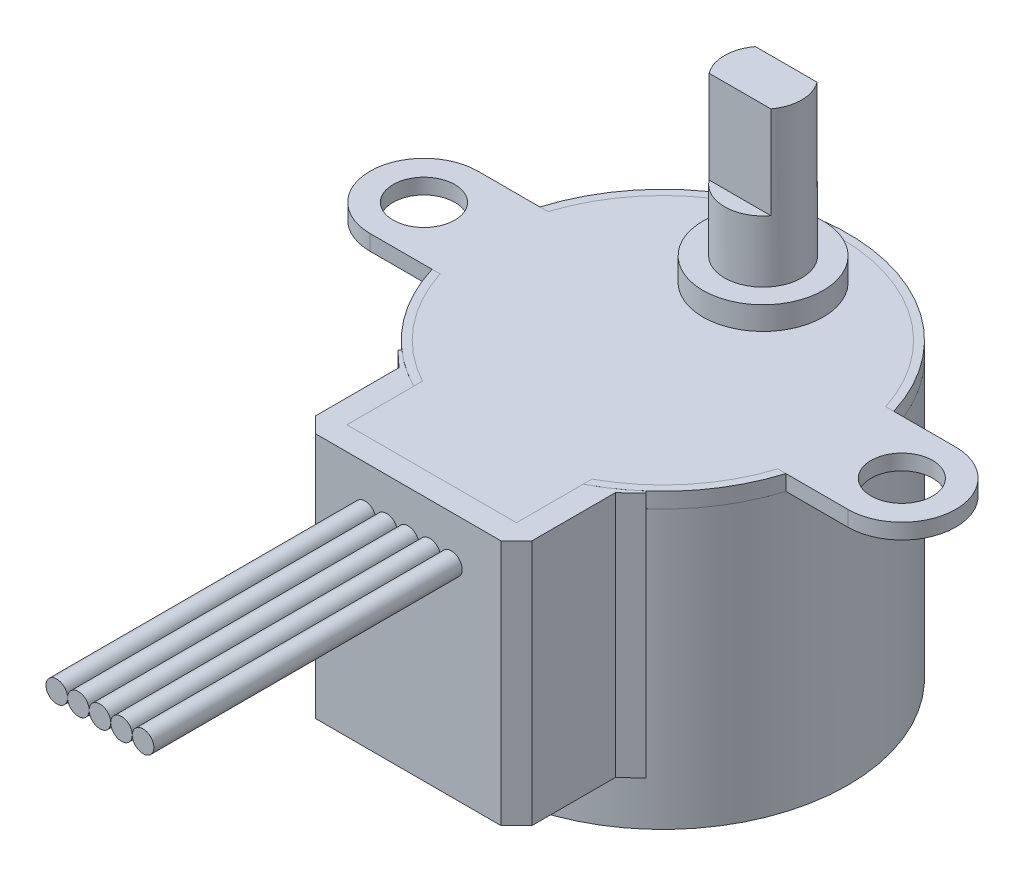
from build123d import *
from build123d.topology import SkipClean

# Parameters (mm, degrees)
SKETCH1_R             = 12
BOSS_EXTRUDE1_DEPTH   = 18
SKETCH2_R             = 2
BOSS_EXTRUDE2_DEPTH   = 1
BOSS_EXTRUDE3_DEPTH   = 1
BOSS_EXTRUDE3_2_DEPTH = 1
BOSS_EXTRUDE3_3_DEPTH = 1
BOSS_EXTRUDE4_DEPTH   = 16
BOSS_EXTRUDE5_DEPTH   = 1
SKETCH6_R             = 3.9
BOSS_EXTRUDE6_DEPTH   = 1.5
SKETCH7_R             = 2.5
BOSS_EXTRUDE7_DEPTH   = 4
BOSS_EXTRUDE8_DEPTH   = 6
SKETCH9_R             = 0.7
BOSS_EXTRUDE9_DEPTH   = 20
LPATTERN1_COUNT       = 5
LPATTERN1_PITCH       = 1.4
CUT_EXTRUDE1_DEPTH    = 0.4
SKETCH11_W            = 1.017628206
SKETCH11_H            = 0.271367522
CUT_EXTRUDE2_DEPTH    = 0.4


with BuildPart() as part:
    # Sketch1 → Boss-Extrude1 (new body)
    with BuildSketch(Plane(origin=(0, 0, 0), x_dir=(1, 0, 0), z_dir=(0, 1, 0))):
        Circle(SKETCH1_R)
    extrude(amount=BOSS_EXTRUDE1_DEPTH)



with BuildPart() as body_2:
    # Sketch2 → Boss-Extrude2 (new body)
    with BuildSketch(Plane(origin=(0, 18, 0), x_dir=(1, 0, 0), z_dir=(0, 1, 0))):
        with BuildLine():
            Line((10.95445115, 3.5), (15.5, 3.5))
            ThreePointArc((15.5, 3.5), (19, 0), (15.5, -3.5))
            Line((15.5, -3.5), (10.95445115, -3.5))
            ThreePointArc((10.95445115, -3.5), (8.864288297, -7.326280979), (5.5, -10.099504938))
            Line((5.5, -10.099504938), (5.5, -15))
            Line((5.5, -15), (-5.5, -15))
            Line((-5.5, -15), (-5.5, -10.099504938))
            ThreePointArc((-5.5, -10.099504938), (-8.864288297, -7.326280979), (-10.95445115, -3.5))
            Line((-10.95445115, -3.5), (-15.5, -3.5))
            ThreePointArc((-15.5, -3.5), (-19, 0), (-15.5, 3.5))
            Line((-15.5, 3.5), (-10.95445115, 3.5))
            ThreePointArc((-10.95445115, 3.5), (0, 11.5), (10.95445115, 3.5))
        make_face()
        with Locations((15.5, 0)):
            Circle(SKETCH2_R, mode=Mode.SUBTRACT)
        with Locations((-15.5, 0)):
            Circle(SKETCH2_R, mode=Mode.SUBTRACT)
    extrude(amount=BOSS_EXTRUDE2_DEPTH)


with BuildPart() as body_3:
    # Sketch3 → Boss-Extrude3 (new body)
    with BuildSketch(Plane(origin=(0, 18, 0), x_dir=(1, 0, 0), z_dir=(0, 1, 0))):
        with BuildLine():
            Line((-11.478240283, 3.5), (-10.95445115, 3.5))
            ThreePointArc((-10.95445115, 3.5), (0, 11.5), (10.95445115, 3.5))
            Line((10.95445115, 3.5), (11.478240283, 3.5))
            ThreePointArc((11.478240283, 3.5), (0, 12), (-11.478240283, 3.5))
        make_face()
    extrude(amount=BOSS_EXTRUDE3_DEPTH)


with BuildPart() as body_4:
    # Sketch3 → Boss-Extrude3 2 (new body)
    with BuildSketch(Plane(origin=(0, 18, 0), x_dir=(1, 0, 0), z_dir=(0, 1, 0))):
        with BuildLine():
            Line((11.478240283, -3.5), (10.95445115, -3.5))
            ThreePointArc((10.95445115, -3.5), (8.864288297, -7.326280979), (5.5, -10.099504938))
            Line((5.5, -10.099504938), (5.5, -10.665364504))
            ThreePointArc((5.5, -10.665364504), (9.214161541, -7.687602169), (11.478240283, -3.5))
        make_face()
    extrude(amount=BOSS_EXTRUDE3_2_DEPTH)


with BuildPart() as body_5:
    # Sketch3 → Boss-Extrude3 3 (new body)
    with BuildSketch(Plane(origin=(0, 18, 0), x_dir=(1, 0, 0), z_dir=(0, 1, 0))):
        with BuildLine():
            Line((-10.95445115, -3.5), (-11.478240283, -3.5))
            ThreePointArc((-11.478240283, -3.5), (-9.214161541, -7.687602169), (-5.5, -10.665364504))
            Line((-5.5, -10.665364504), (-5.5, -10.099504938))
            ThreePointArc((-5.5, -10.099504938), (-8.864288297, -7.326280979), (-10.95445115, -3.5))
        make_face()
    extrude(amount=BOSS_EXTRUDE3_3_DEPTH)


with BuildPart() as body_6:
    # Sketch4 → Boss-Extrude4 (new body)
    with BuildSketch(Plane(origin=(0, 19, 0), x_dir=(1, 0, 0), z_dir=(0, 1, 0))):
        with BuildLine():
            Line((5.5, -15), (5.5, -10.665364504))
            ThreePointArc((5.5, -10.665364504), (6.763786043, -9.91217425), (7.925906242, -9.009995019))
            Line((7.925906242, -9.009995019), (8.044708004, -9.145046235))
            Line((8.044708004, -9.145046235), (7.02, -10.099504938))
            Line((7.02, -10.099504938), (7.02, -15.52))
            Line((7.02, -15.52), (6.02, -16.52))
            Line((6.02, -16.52), (-6.02, -16.52))
            Line((-6.02, -16.52), (-7.02, -15.52))
            Line((-7.02, -15.52), (-7.02, -10.099504938))
            Line((-7.02, -10.099504938), (-8.044708004, -9.145046235))
            Line((-8.044708004, -9.145046235), (-7.925906242, -9.009995019))
            ThreePointArc((-7.925906242, -9.009995019), (-6.763786043, -9.91217425), (-5.5, -10.665364504))
            Line((-5.5, -10.665364504), (-5.5, -15))
            Line((-5.5, -15), (5.5, -15))
        make_face()
    extrude(amount=-BOSS_EXTRUDE4_DEPTH)


with BuildPart() as part_1:
    add(part.part)

    add(body_6.part)  # Boss-Extrude5 merges body 6
    # Sketch5 → Boss-Extrude5 (add)
    with BuildSketch(Plane.XZ.offset(-3)):
        with BuildLine():
            ThreePointArc((-7.925906242, 9.009995019), (0, 12), (7.925906242, 9.009995019))
            Line((7.925906242, 9.009995019), (8.044708004, 9.145046235))
            Line((8.044708004, 9.145046235), (7.02, 10.099504938))
            Line((7.02, 10.099504938), (7.02, 15.52))
            Line((7.02, 15.52), (6.02, 16.52))
            Line((6.02, 16.52), (-6.02, 16.52))
            Line((-6.02, 16.52), (-7.02, 15.52))
            Line((-7.02, 15.52), (-7.02, 10.099504938))
            Line((-7.02, 10.099504938), (-8.044708004, 9.145046235))
            Line((-8.044708004, 9.145046235), (-7.925906242, 9.009995019))
        make_face()
    extrude(amount=-BOSS_EXTRUDE5_DEPTH)

    # Sketch10 → Cut-Extrude1 (cut)
    # profile 1 of 29: a face of its own
    with BuildSketch(Plane.XZ):
        with BuildLine():
            Line((9.177876089, -0.160064436), (10.493637558, -0.256792117))
            Line((10.493637558, -0.256792117), (10.473497, -0.529749683))
            add(Edge.make_bspline(
                [(10.473497, -0.529749683), (10.471542654, -0.553430154), (10.467769332, -0.599150858), (10.461057781, -0.665198136), (10.452797793, -0.72606985), (10.443761116, -0.781816481), (10.433023463, -0.832235902), (10.421842524, -0.877694614), (10.409393359, -0.918062771), (10.399284984, -0.942692819), (10.394524811, -0.95429145)],
                knots=[0, 0, 0, 0, 1.315269773, 2.539436774, 3.674248393, 4.715259766, 5.664677289, 6.526855273, 7.306275744, 8, 8, 8, 8], degree=3))
            add(Edge.make_bspline(
                [(10.394524811, -0.95429145), (10.387538294, -0.969528457), (10.373733972, -0.999634526), (10.3487913, -1.04200778), (10.321575484, -1.081876186), (10.290821475, -1.118382918), (10.257709396, -1.152633099), (10.221255042, -1.183550165), (10.182072829, -1.211791295), (10.140275089, -1.237181926), (10.096169371, -1.259398898), (10.050049976, -1.278006744), (10.002280409, -1.293094805), (9.952683769, -1.304807431), (9.901402531, -1.313015384), (9.848347927, -1.317392549), (9.793633878, -1.318584887), (9.756646012, -1.316537577), (9.73783661, -1.315496461)],
                knots=[0, 0, 0, 0, 1.001561074, 1.978936359, 2.935558703, 3.884261451, 4.829134493, 5.780611467, 6.737743912, 7.714134163, 8.701390494, 9.687006863, 10.684158211, 11.693583381, 12.731145673, 13.785943978, 14.874088257, 16, 16, 16, 16], degree=3))
            add(Edge.make_bspline(
                [(9.73783661, -1.315496461), (9.721650764, -1.31399414), (9.689699826, -1.311028551), (9.642691766, -1.303581773), (9.597397085, -1.293510887), (9.55365671, -1.281013727), (9.511610201, -1.266067553), (9.471307426, -1.248084611), (9.43268666, -1.227758181), (9.395865191, -1.204978816), (9.361328467, -1.180165654), (9.329187281, -1.153800298), (9.299292455, -1.126407239), (9.272654262, -1.097010151), (9.247924161, -1.06670129), (9.22605163, -1.034779337), (9.206858097, -1.001318896), (9.189888438, -0.96637068), (9.175800153, -0.928830282), (9.164166208, -0.888330556), (9.1549432, -0.844672793), (9.148449374, -0.797733091), (9.144177551, -0.747578216), (9.142799246, -0.69415012), (9.143527831, -0.637474449), (9.145908748, -0.598733032), (9.147135237, -0.578776042)],
                knots=[0, 0, 0, 0, 1.08768353, 2.147092524, 3.182678784, 4.191251041, 5.189810895, 6.166429479, 7.142242529, 8.108553836, 9.06175559, 9.986010116, 10.889575605, 11.772422482, 12.638462728, 13.505914285, 14.358717484, 15.218073189, 16.103055223, 17.03854787, 18.035706728, 19.086636339, 20.207972142, 21.402692001, 22.662040391, 24, 24, 24, 24], degree=3))
            Line((9.147135237, -0.578776042), (9.177876089, -0.160064436))
        make_face()
        with BuildLine():
            Line((9.292889277, -0.295218182), (9.281758969, -0.447332399))
            add(Edge.make_bspline(
                [(9.281758969, -0.447332399), (9.280278974, -0.469235432), (9.277439584, -0.511256722), (9.274417794, -0.571682733), (9.273097204, -0.6270002), (9.273046595, -0.677189337), (9.274192133, -0.72228077), (9.277050479, -0.762166082), (9.281302972, -0.79698296), (9.285779233, -0.818277287), (9.287854138, -0.828147953)],
                knots=[0, 0, 0, 0, 1.379152033, 2.645923289, 3.800565093, 4.854981369, 5.798814426, 6.63348365, 7.366571828, 8, 8, 8, 8], degree=3))
            add(Edge.make_bspline(
                [(9.287854138, -0.828147953), (9.291174188, -0.840581424), (9.297734156, -0.865148277), (9.311216234, -0.90055104), (9.327016052, -0.934167377), (9.345470735, -0.965988852), (9.366417469, -0.995934428), (9.389919711, -1.024191372), (9.415823841, -1.05078354), (9.444562128, -1.075021607), (9.475223829, -1.097441351), (9.508265082, -1.116960529), (9.543132352, -1.134310539), (9.579914872, -1.149068692), (9.618602952, -1.161394533), (9.659227579, -1.170734193), (9.70176638, -1.17812563), (9.730919771, -1.180646975), (9.74578683, -1.181932759)],
                knots=[0, 0, 0, 0, 0.992441431, 1.960929688, 2.918321022, 3.855927231, 4.795711161, 5.734753253, 6.689106823, 7.656130856, 8.632335702, 9.616597919, 10.613383476, 11.634823392, 12.671702244, 13.743047337, 14.849044818, 16, 16, 16, 16], degree=3))
            add(Edge.make_bspline(
                [(9.74578683, -1.181932759), (9.761416794, -1.182872895), (9.792135619, -1.184720619), (9.837563448, -1.1834551), (9.881509242, -1.179647152), (9.92392636, -1.172426607), (9.964868097, -1.162387359), (10.00421366, -1.14936724), (10.042102432, -1.133418542), (10.078227127, -1.114373924), (10.112526603, -1.092685879), (10.144261634, -1.068265695), (10.173703407, -1.041598287), (10.200592002, -1.0123993), (10.224601902, -0.980436952), (10.246512612, -0.946314352), (10.265992684, -0.909759602), (10.276552889, -0.883899945), (10.281896689, -0.870814136)],
                knots=[0, 0, 0, 0, 1.124805702, 2.210671102, 3.262468939, 4.292566316, 5.29953605, 6.289248223, 7.267883509, 8.250402733, 9.220787548, 10.180712332, 11.124462921, 12.072495513, 13.028571033, 13.993604286, 14.98469999, 16, 16, 16, 16], degree=3))
            add(Edge.make_bspline(
                [(10.281896689, -0.870814136), (10.285716461, -0.859896349), (10.29384052, -0.836675915), (10.304431226, -0.798839828), (10.313694123, -0.755766191), (10.322774478, -0.707729995), (10.330579587, -0.654574597), (10.337617641, -0.59641409), (10.344398346, -0.533183666), (10.347740425, -0.489214489), (10.349473562, -0.466412927)],
                knots=[0, 0, 0, 0, 0.675018732, 1.435659808, 2.291302379, 3.245923024, 4.288653507, 5.426360175, 6.665360354, 8, 8, 8, 8], degree=3))
            Line((10.349473562, -0.466412927), (10.356363753, -0.373395349))
            Line((10.356363753, -0.373395349), (9.292889277, -0.295218182))
        make_face(mode=Mode.SUBTRACT)
    # profile 2 of 29: a face of its own
    with BuildSketch(Plane.XZ):
        with BuildLine():
            Line((9.21787335, -2.304205118), (9.141551234, -2.396427674))
            add(Edge.make_bspline(
                [(9.141551234, -2.396427674), (9.127295553, -2.384560518), (9.099591519, -2.361498267), (9.062624947, -2.323945337), (9.030932727, -2.285407333), (9.004060168, -2.245920955), (8.982234812, -2.205061133), (8.964752769, -2.163033039), (8.951037286, -2.119888871), (8.941768173, -2.075234577), (8.936571085, -2.028909951), (8.936675282, -1.980736248), (8.940347392, -1.930667564), (8.946699465, -1.897107081), (8.949950924, -1.879928359)],
                knots=[0, 0, 0, 0, 1.143887285, 2.222993983, 3.245333682, 4.218826708, 5.164914551, 6.098152217, 7.023799537, 7.953752998, 8.907720092, 9.894216434, 10.922105163, 12, 12, 12, 12], degree=3))
            add(Edge.make_bspline(
                [(8.949950924, -1.879928359), (8.954383961, -1.861107748), (8.963046692, -1.824329834), (8.981429446, -1.771919909), (9.003930949, -1.723617508), (9.030835148, -1.679652805), (9.061712356, -1.639855099), (9.096775802, -1.604306121), (9.135917217, -1.572784646), (9.179031328, -1.546213731), (9.224045916, -1.523538927), (9.270030468, -1.505255524), (9.316333364, -1.49098938), (9.363105451, -1.481429173), (9.410230184, -1.476401968), (9.457663995, -1.475677779), (9.50561817, -1.478882221), (9.537338963, -1.484751025), (9.553372648, -1.487717488)],
                knots=[0, 0, 0, 0, 1.152407199, 2.251953179, 3.305305354, 4.324380763, 5.31908053, 6.302459704, 7.295428391, 8.308317638, 9.316593958, 10.297713137, 11.255866845, 12.202174942, 13.139911257, 14.077691957, 15.028344529, 16, 16, 16, 16], degree=3))
            add(Edge.make_bspline(
                [(9.553372648, -1.487717488), (9.568282143, -1.491175174), (9.597730603, -1.498004615), (9.640322886, -1.512554492), (9.681006463, -1.530066973), (9.719885987, -1.550688147), (9.75643208, -1.574975542), (9.791175894, -1.602156557), (9.823899495, -1.632671659), (9.843823257, -1.655209035), (9.853890978, -1.666597446)],
                knots=[0, 0, 0, 0, 1.029913264, 2.034231163, 3.02523592, 4.009705229, 4.992826257, 5.975569435, 6.977030496, 8, 8, 8, 8], degree=3))
            add(Edge.make_bspline(
                [(9.853890978, -1.666597446), (9.865827395, -1.681620809), (9.889234894, -1.711081856), (9.917647753, -1.759088597), (9.940220725, -1.808595216), (9.956239053, -1.860150899), (9.965740187, -1.913569476), (9.969141894, -1.96867807), (9.966353065, -2.025619144), (9.959446955, -2.063547428), (9.955918806, -2.082923985)],
                knots=[0, 0, 0, 0, 1.034318927, 2.028315371, 3.00108064, 3.964423408, 4.93302264, 5.921610413, 6.938205707, 8, 8, 8, 8], degree=3))
            add(Edge.make_bspline(
                [(9.955918806, -2.082923985), (9.951209124, -2.102653322), (9.941985393, -2.141292468), (9.921361161, -2.196258772), (9.89553941, -2.246901072), (9.864749296, -2.293456336), (9.828228892, -2.335295369), (9.787006462, -2.373111788), (9.740528, -2.406696392), (9.706429055, -2.424823409), (9.689056409, -2.434058717)],
                knots=[0, 0, 0, 0, 1.063187875, 2.082212485, 3.070692112, 4.039680887, 5.002144486, 5.976183075, 6.968910798, 8, 8, 8, 8], degree=3))
            add(Edge.make_bspline(
                [(9.689056409, -2.434058717), (9.67617561, -2.440056149), (9.650522164, -2.452000656), (9.610051435, -2.46539618), (9.568418283, -2.475589758), (9.525287624, -2.481818187), (9.480894419, -2.484807755), (9.435166057, -2.483901781), (9.388125632, -2.479417127), (9.3566156, -2.473770044), (9.34057175, -2.470894738)],
                knots=[0, 0, 0, 0, 0.954543653, 1.901072649, 2.86038928, 3.83297828, 4.826909932, 5.848541876, 6.904549768, 8, 8, 8, 8], degree=3))
            Line((9.34057175, -2.470894738), (9.519981723, -1.612535948))
            add(Edge.make_bspline(
                [(9.519981723, -1.612535948), (9.506230482, -1.610267407), (9.479282252, -1.605821762), (9.439016545, -1.60328748), (9.399974976, -1.603865881), (9.362213517, -1.60855284), (9.325588081, -1.616119039), (9.290205463, -1.627542716), (9.256254277, -1.642840086), (9.223704132, -1.660983514), (9.193443259, -1.682134403), (9.165613293, -1.705413936), (9.141167443, -1.731342993), (9.11959487, -1.759300394), (9.100813461, -1.789391149), (9.085591297, -1.821949883), (9.072850457, -1.856475539), (9.067266969, -1.880648949), (9.064434097, -1.892913719)],
                knots=[0, 0, 0, 0, 1.120694629, 2.196219064, 3.241181828, 4.257598003, 5.252847245, 6.24626773, 7.24210045, 8.244429806, 9.240059616, 10.208297441, 11.158446595, 12.100936252, 13.045647408, 14.005712535, 14.988166113, 16, 16, 16, 16], degree=3))
            add(Edge.make_bspline(
                [(9.064434097, -1.892913719), (9.062269073, -1.905074133), (9.057960418, -1.929274805), (9.055447799, -1.966105796), (9.055971064, -2.003067016), (9.059611126, -2.039877499), (9.066472874, -2.075682113), (9.076066352, -2.109685367), (9.087867981, -2.141765045), (9.103204878, -2.172347738), (9.123015009, -2.203124844), (9.149054482, -2.234819365), (9.180816903, -2.269339932), (9.204992665, -2.292086107), (9.21787335, -2.304205118)],
                knots=[0, 0, 0, 0, 0.960155026, 1.910822903, 2.865974328, 3.832695431, 4.784058277, 5.697653052, 6.578225648, 7.438596137, 8.353430245, 9.418970881, 10.624844891, 12, 12, 12, 12], degree=3))
        make_face()
        with BuildLine():
            add(Edge.make_bspline(
                [(9.474930474, -2.358001609), (9.491487238, -2.357020756), (9.523279242, -2.355137338), (9.568575983, -2.34692101), (9.60978003, -2.335840863), (9.647051899, -2.320261923), (9.680900072, -2.300212069), (9.712470222, -2.276191612), (9.741636272, -2.247558602), (9.768493711, -2.215170735), (9.79219855, -2.179549756), (9.812192446, -2.141743284), (9.827536072, -2.101739222), (9.834308085, -2.074087557), (9.83772553, -2.060133353)],
                knots=[0, 0, 0, 0, 1.170454475, 2.247485822, 3.245055202, 4.179001187, 5.090675024, 6.016584035, 6.974012745, 7.970957595, 8.983246324, 9.990697579, 10.986020728, 12, 12, 12, 12], degree=3))
            add(Edge.make_bspline(
                [(9.83772553, -2.060133353), (9.839894321, -2.048592694), (9.844175616, -2.02581089), (9.846619121, -1.991451365), (9.846511706, -1.957755986), (9.843066853, -1.924722904), (9.836309744, -1.89246479), (9.826765286, -1.860764649), (9.814086588, -1.829686024), (9.803371769, -1.809875321), (9.797974428, -1.799896141)],
                knots=[0, 0, 0, 0, 1.045310063, 2.063491085, 3.062919018, 4.044056039, 5.016348523, 5.994704502, 6.989879068, 8, 8, 8, 8], degree=3))
            add(Edge.make_bspline(
                [(9.797974428, -1.799896141), (9.793510192, -1.792653037), (9.784416844, -1.777899324), (9.768112035, -1.757088322), (9.749690263, -1.73680793), (9.729005785, -1.717177266), (9.705877561, -1.698448838), (9.680609448, -1.680331314), (9.652977391, -1.663168214), (9.633543376, -1.652463944), (9.623599595, -1.646986902)],
                knots=[0, 0, 0, 0, 0.868628382, 1.769337528, 2.695676197, 3.665940874, 4.67931275, 5.733606716, 6.840357044, 8, 8, 8, 8], degree=3))
            Line((9.623599595, -1.646986902), (9.474930474, -2.358001609))
        make_face(mode=Mode.SUBTRACT)
    # profile 3 of 29: a face of its own
    with BuildSketch(Plane.XZ):
        with BuildLine():
            Line((9.508834772, -3.260230682), (9.453713244, -3.158732869))
            add(Edge.make_bspline(
                [(9.453713244, -3.158732869), (9.463515263, -3.153218859), (9.482524486, -3.142525445), (9.508797078, -3.124669311), (9.532383722, -3.10618205), (9.552629066, -3.086512608), (9.570529334, -3.066565964), (9.585160191, -3.045592642), (9.596756507, -3.023646969), (9.602287935, -3.008368928), (9.605032438, -3.000788491)],
                knots=[0, 0, 0, 0, 1.203464887, 2.333900038, 3.397239137, 4.407136374, 5.351885649, 6.262167088, 7.137747327, 8, 8, 8, 8], degree=3))
            add(Edge.make_bspline(
                [(9.605032438, -3.000788491), (9.60754656, -2.991313188), (9.612493166, -2.972670262), (9.613040836, -2.943970301), (9.608516242, -2.915888286), (9.598383781, -2.889323485), (9.584423726, -2.865203491), (9.566836243, -2.844851912), (9.54560813, -2.829321529), (9.529414622, -2.823149882), (9.521290117, -2.820053482)],
                knots=[0, 0, 0, 0, 1.064314682, 2.094069312, 3.09834453, 4.145477579, 5.171721211, 6.11923949, 7.056396699, 8, 8, 8, 8], degree=3))
            add(Edge.make_bspline(
                [(9.521290117, -2.820053482), (9.513649629, -2.818166706), (9.498267202, -2.814368102), (9.474040997, -2.814078494), (9.449091649, -2.818093892), (9.432959517, -2.824088416), (9.424562436, -2.82720868)],
                knots=[0, 0, 0, 0, 0.952039757, 1.916720812, 2.915613726, 4, 4, 4, 4], degree=3))
            add(Edge.make_bspline(
                [(9.424562436, -2.82720868), (9.419916035, -2.82922612), (9.409996204, -2.833533252), (9.395314141, -2.842650298), (9.378972418, -2.853182167), (9.361544911, -2.866209089), (9.343172036, -2.881643271), (9.323377895, -2.898953499), (9.302547363, -2.918515479), (9.288487082, -2.932554309), (9.281193462, -2.939836802)],
                knots=[0, 0, 0, 0, 0.662347027, 1.414077275, 2.257694229, 3.208355122, 4.25969666, 5.398783728, 6.650646961, 8, 8, 8, 8], degree=3))
            add(Edge.make_bspline(
                [(9.281193462, -2.939836802), (9.27223653, -2.948724685), (9.25484771, -2.965979456), (9.228798246, -2.990072958), (9.203431735, -3.011257266), (9.179502464, -3.030317899), (9.156028581, -3.046140361), (9.133842716, -3.059756238), (9.112592786, -3.07092232), (9.098306678, -3.076356714), (9.091448203, -3.078965658)],
                knots=[0, 0, 0, 0, 1.277363219, 2.479849088, 3.590478922, 4.622625706, 5.5750706, 6.453845947, 7.257722391, 8, 8, 8, 8], degree=3))
            add(Edge.make_bspline(
                [(9.091448203, -3.078965658), (9.078290929, -3.082793404), (9.052246767, -3.090370237), (9.011694015, -3.093419396), (8.970951283, -3.090784868), (8.944554697, -3.083830492), (8.93111876, -3.080290694)],
                knots=[0, 0, 0, 0, 1.00700325, 1.9933123, 2.978590274, 4, 4, 4, 4], degree=3))
            add(Edge.make_bspline(
                [(8.93111876, -3.080290694), (8.9218658, -3.077105281), (8.90364153, -3.070831414), (8.877743227, -3.058564691), (8.853931533, -3.043860467), (8.831614448, -3.027436927), (8.81157979, -3.008466851), (8.793016433, -2.987685885), (8.776639163, -2.964494108), (8.762191945, -2.939482885), (8.749917469, -2.913230123), (8.741057538, -2.886026594), (8.734437746, -2.858488495), (8.731193496, -2.830396102), (8.730168188, -2.801809768), (8.732830398, -2.772902611), (8.737734053, -2.743410182), (8.743297549, -2.723986828), (8.746143633, -2.714050544)],
                knots=[0, 0, 0, 0, 1.025822371, 2.020419949, 2.997605284, 3.957420201, 4.920983712, 5.885793518, 6.875546546, 7.892545378, 8.912325548, 9.908432217, 10.888249115, 11.877655196, 12.86935754, 13.882636044, 14.916833294, 16, 16, 16, 16], degree=3))
            add(Edge.make_bspline(
                [(8.746143633, -2.714050544), (8.750694405, -2.700939032), (8.759770757, -2.674788595), (8.778832946, -2.637937566), (8.801867343, -2.60344759), (8.828516807, -2.571550054), (8.85836045, -2.542628962), (8.89093185, -2.517782115), (8.925804722, -2.496819583), (8.950669592, -2.48654535), (8.963184648, -2.481374095)],
                knots=[0, 0, 0, 0, 1.011205204, 2.016812224, 3.015689099, 4.031154442, 5.042687986, 6.04006773, 7.013521366, 8, 8, 8, 8], degree=3))
            Line((8.963184648, -2.481374095), (9.02493136, -2.583136915))
            add(Edge.make_bspline(
                [(9.02493136, -2.583136915), (9.014429917, -2.588105953), (8.994011239, -2.597767596), (8.965502851, -2.614422573), (8.940350245, -2.632783153), (8.917972584, -2.652122049), (8.899099312, -2.673261911), (8.883057969, -2.695567272), (8.870043483, -2.719294091), (8.864114527, -2.73612844), (8.861156821, -2.744526388)],
                knots=[0, 0, 0, 0, 1.175506779, 2.28561874, 3.335334936, 4.323553076, 5.273164234, 6.196054078, 7.10008736, 8, 8, 8, 8], degree=3))
            add(Edge.make_bspline(
                [(8.861156821, -2.744526388), (8.858036871, -2.756195826), (8.851917021, -2.77908569), (8.850886515, -2.814319924), (8.855790007, -2.848744356), (8.867850227, -2.881157048), (8.884739431, -2.910477117), (8.906302445, -2.934884079), (8.931989555, -2.953949099), (8.951654395, -2.961473873), (8.961594604, -2.965277507)],
                knots=[0, 0, 0, 0, 1.075417088, 2.109454669, 3.122337587, 4.162823064, 5.177424398, 6.12722605, 7.053347741, 8, 8, 8, 8], degree=3))
            add(Edge.make_bspline(
                [(8.961594604, -2.965277507), (8.970023518, -2.967451511), (8.986779482, -2.971773247), (9.012666893, -2.972578916), (9.038592206, -2.969303527), (9.054963797, -2.963313448), (9.063357425, -2.960242367)],
                knots=[0, 0, 0, 0, 1.002451304, 1.992787948, 2.970913083, 4, 4, 4, 4], degree=3))
            add(Edge.make_bspline(
                [(9.063357425, -2.960242367), (9.067815449, -2.958202844), (9.077429098, -2.953804649), (9.092045869, -2.944874895), (9.107799264, -2.93328377), (9.125463591, -2.919787982), (9.144386271, -2.903593042), (9.164792748, -2.885026011), (9.186530738, -2.863992), (9.201364893, -2.849054572), (9.209111465, -2.841254069)],
                knots=[0, 0, 0, 0, 0.621792597, 1.340884709, 2.168466231, 3.103577698, 4.16153793, 5.328203975, 6.604756361, 8, 8, 8, 8], degree=3))
            add(Edge.make_bspline(
                [(9.209111465, -2.841254069), (9.217634819, -2.832903631), (9.234108442, -2.816764213), (9.258800356, -2.794059023), (9.282786372, -2.774008136), (9.30595281, -2.756409699), (9.328121819, -2.741153394), (9.34965602, -2.728781341), (9.370148085, -2.718334325), (9.383961407, -2.713303399), (9.390641496, -2.710870455)],
                knots=[0, 0, 0, 0, 1.270882378, 2.456314283, 3.571840409, 4.599294955, 5.554413817, 6.435530087, 7.243426241, 8, 8, 8, 8], degree=3))
            add(Edge.make_bspline(
                [(9.390641496, -2.710870455), (9.403451865, -2.707239324), (9.428996746, -2.699998563), (9.468913531, -2.697204775), (9.509307373, -2.700125776), (9.535506666, -2.707244593), (9.548850881, -2.710870455)],
                knots=[0, 0, 0, 0, 0.99167728, 1.977482366, 2.969861098, 4, 4, 4, 4], degree=3))
            add(Edge.make_bspline(
                [(9.548850881, -2.710870455), (9.557387803, -2.713814308), (9.574222408, -2.719619514), (9.598062988, -2.730720179), (9.619992784, -2.743896064), (9.640316135, -2.75869254), (9.658613363, -2.775780186), (9.675137725, -2.794687418), (9.689782861, -2.815478492), (9.702335153, -2.837909523), (9.713080042, -2.861407574), (9.720877192, -2.885828508), (9.726615336, -2.910626356), (9.729522457, -2.935958386), (9.729685585, -2.961787313), (9.727586184, -2.988138853), (9.722838921, -3.015047913), (9.717654199, -3.032808452), (9.715010486, -3.041864629)],
                knots=[0, 0, 0, 0, 1.045443316, 2.061588995, 3.038929457, 4.004795798, 4.967677126, 5.932079251, 6.908562491, 7.907304014, 8.905626206, 9.895683083, 10.871147394, 11.849611821, 12.842097512, 13.858294697, 14.907934993, 16, 16, 16, 16], degree=3))
            add(Edge.make_bspline(
                [(9.715010486, -3.041864629), (9.71132607, -3.052500657), (9.70389729, -3.073945769), (9.687262836, -3.104158464), (9.667232635, -3.133226664), (9.643456428, -3.161302066), (9.615423163, -3.188011925), (9.583559569, -3.213641043), (9.54792254, -3.238217523), (9.522120637, -3.252748447), (9.508834772, -3.260230682)],
                knots=[0, 0, 0, 0, 0.876238712, 1.766734439, 2.678002461, 3.626009222, 4.629438453, 5.6921692, 6.811656252, 8, 8, 8, 8], degree=3))
        make_face()
    # profile 4 of 29: a face of its own
    with BuildSketch(Plane.XZ):
        with BuildLine():
            add(Edge.make_bspline(
                [(9.897215921, -3.677026739), (9.894464381, -3.683433534), (9.889091361, -3.695944284), (9.876800798, -3.712273842), (9.861297839, -3.725411451), (9.843408269, -3.735605947), (9.82403673, -3.742584667), (9.803923448, -3.745236375), (9.783676335, -3.744046035), (9.770749487, -3.740022509), (9.764182234, -3.737978429)],
                knots=[0, 0, 0, 0, 1.027065793, 2.005583706, 2.986273692, 4.009021272, 5.032351211, 6.006597812, 6.987287799, 8, 8, 8, 8], degree=3))
            add(Edge.make_bspline(
                [(9.764182234, -3.737978429), (9.757941235, -3.735325412), (9.745645512, -3.730098562), (9.729814718, -3.717732134), (9.716496293, -3.702591255), (9.706414937, -3.684684454), (9.699416564, -3.665333776), (9.696762995, -3.645213436), (9.697984899, -3.624888673), (9.701982363, -3.611865976), (9.704025567, -3.605209749)],
                knots=[0, 0, 0, 0, 1.002510419, 1.975098773, 2.950421229, 3.977897747, 5.005959317, 5.9847106, 6.96993506, 8, 8, 8, 8], degree=3))
            add(Edge.make_bspline(
                [(9.704025567, -3.605209749), (9.706788687, -3.598982201), (9.712217235, -3.586747283), (9.724435704, -3.570822112), (9.739782525, -3.557823812), (9.757565109, -3.547668598), (9.776885663, -3.54082208), (9.796748003, -3.537787731), (9.816789757, -3.538656551), (9.829524354, -3.542721343), (9.835999224, -3.544788074)],
                knots=[0, 0, 0, 0, 1.014982093, 1.994079047, 2.967290129, 4.00164256, 5.036583957, 6.010689124, 6.98854052, 8, 8, 8, 8], degree=3))
            add(Edge.make_bspline(
                [(9.835999224, -3.544788074), (9.842315758, -3.54754881), (9.854719905, -3.55297023), (9.870975801, -3.565282069), (9.884401069, -3.58061058), (9.894594466, -3.598603977), (9.901423538, -3.617908817), (9.904574576, -3.637787257), (9.903255754, -3.657806232), (9.899251204, -3.670549877), (9.897215921, -3.677026739)],
                knots=[0, 0, 0, 0, 1.02040161, 2.003822581, 2.998023948, 4.025896208, 5.054353744, 6.022356186, 6.994877268, 8, 8, 8, 8], degree=3))
        make_face()
    # profile 5 of 29: a face of its own
    with BuildSketch(Plane.XZ):
        Polygon((9.544491145, -3.479066253), (9.500499926, -3.596994521), (8.590464703, -3.258845149), (8.634455922, -3.14091688), align=None)
    # profile 6 of 29: a face of its own
    with BuildSketch(Plane.XZ):
        with BuildLine():
            Line((9.033556457, -4.627785884), (8.979759966, -4.742269058))
            Line((8.979759966, -4.742269058), (8.276165465, -4.41259992))
            add(Edge.make_bspline(
                [(8.276165465, -4.41259992), (8.261279425, -4.405536662), (8.232471486, -4.391867619), (8.191475343, -4.370566326), (8.153851468, -4.350153757), (8.120069593, -4.329744048), (8.089507298, -4.310508971), (8.062998227, -4.29094127), (8.039620738, -4.272317679), (8.026079281, -4.25909147), (8.019638355, -4.252800491)],
                knots=[0, 0, 0, 0, 1.302346687, 2.520342791, 3.651645206, 4.685125581, 5.640036855, 6.504581685, 7.288711828, 8, 8, 8, 8], degree=3))
            add(Edge.make_bspline(
                [(8.019638355, -4.252800491), (8.011538933, -4.244275431), (7.99550066, -4.22739432), (7.974269829, -4.199996491), (7.955964291, -4.171268173), (7.940250526, -4.141368143), (7.926926772, -4.110424488), (7.916484757, -4.078138452), (7.909246563, -4.044548656), (7.904063701, -4.009947313), (7.90207969, -3.974390456), (7.902618453, -3.93835074), (7.905731464, -3.90183101), (7.912078523, -3.864980654), (7.920380917, -3.827542263), (7.931948257, -3.789773511), (7.946254231, -3.751687637), (7.957494248, -3.726528612), (7.963191791, -3.713775551)],
                knots=[0, 0, 0, 0, 0.97319311, 1.927092817, 2.864473531, 3.790369821, 4.720991867, 5.650837544, 6.59490021, 7.563078105, 8.544918099, 9.539748822, 10.545622714, 11.576112237, 12.633631802, 13.718814702, 14.843671559, 16, 16, 16, 16], degree=3))
            add(Edge.make_bspline(
                [(7.963191791, -3.713775551), (7.972279995, -3.695518214), (7.990013296, -3.659893699), (8.02070308, -3.610022426), (8.053982532, -3.564928987), (8.089802345, -3.524792421), (8.127378175, -3.489920254), (8.165683343, -3.459980113), (8.205074261, -3.43582015), (8.245975162, -3.416681372), (8.290447249, -3.402740627), (8.339666819, -3.393128013), (8.394498765, -3.387666256), (8.432860414, -3.38724292), (8.452925364, -3.387021495)],
                knots=[0, 0, 0, 0, 1.166424737, 2.27597901, 3.345464041, 4.369185133, 5.349073659, 6.275095576, 7.146251873, 7.987452886, 8.852193148, 9.805736541, 10.852296848, 12, 12, 12, 12], degree=3))
            Line((8.452925364, -3.387021495), (8.395153763, -3.510514918))
            add(Edge.make_bspline(
                [(8.395153763, -3.510514918), (8.377223117, -3.512585893), (8.342130039, -3.516639116), (8.291947332, -3.530905223), (8.245710401, -3.551512599), (8.210485882, -3.574024019), (8.184468147, -3.595133373), (8.165688811, -3.612850944), (8.147825597, -3.632426019), (8.130503432, -3.653700036), (8.114044964, -3.676809123), (8.098578078, -3.701828139), (8.083158987, -3.728284766), (8.074268281, -3.747094267), (8.069724743, -3.756706741)],
                knots=[0, 0, 0, 0, 1.5082435, 2.951868438, 4.344652248, 5.730595155, 6.434699903, 7.14575246, 7.888516237, 8.650339971, 9.439908697, 10.260151635, 11.110861716, 12, 12, 12, 12], degree=3))
            add(Edge.make_bspline(
                [(8.069724743, -3.756706741), (8.061513104, -3.775534113), (8.045649423, -3.811905831), (8.029720796, -3.867454669), (8.020790085, -3.921017404), (8.020039803, -3.972349028), (8.025931819, -4.020209447), (8.036798978, -4.064235601), (8.053732037, -4.103757154), (8.072472677, -4.133585014), (8.091472103, -4.155230636), (8.108476801, -4.171635588), (8.128486538, -4.188131453), (8.151676424, -4.204425805), (8.177689229, -4.221102236), (8.206614241, -4.238119221), (8.238667648, -4.255006499), (8.261285226, -4.265778574), (8.272985377, -4.271351005)],
                knots=[0, 0, 0, 0, 1.540365786, 2.975760542, 4.325291764, 5.605148762, 6.814116876, 7.93662572, 8.997062957, 10.028901744, 10.564708603, 11.155537774, 11.800751705, 12.509107722, 13.281591917, 14.119698584, 15.027313672, 16, 16, 16, 16], degree=3))
            Line((8.272985377, -4.271351005), (8.31856664, -4.2928166))
            add(Edge.make_bspline(
                [(8.31856664, -4.2928166), (8.310752141, -4.275749657), (8.29524192, -4.24187518), (8.279007269, -4.1883877), (8.269632714, -4.133552474), (8.265964978, -4.077813641), (8.269421493, -4.022011465), (8.278264507, -3.966862095), (8.293706599, -3.912889333), (8.308473872, -3.878467975), (8.315916567, -3.861119635)],
                knots=[0, 0, 0, 0, 1.007600688, 1.999886378, 2.992296888, 3.990781878, 4.993722806, 5.989226091, 6.986571407, 8, 8, 8, 8], degree=3))
            add(Edge.make_bspline(
                [(8.315916567, -3.861119635), (8.320830389, -3.851162594), (8.330599344, -3.831367437), (8.347356191, -3.802895157), (8.366075458, -3.77588182), (8.385956621, -3.749878064), (8.408036734, -3.725713475), (8.431284692, -3.702494196), (8.456556756, -3.680872022), (8.483144919, -3.660405451), (8.511176595, -3.642198461), (8.539479795, -3.625153044), (8.568875875, -3.610973404), (8.598610295, -3.598437855), (8.629104761, -3.588320008), (8.660102822, -3.580383569), (8.691712177, -3.574539833), (8.723763989, -3.570847655), (8.755988392, -3.569258835), (8.788210758, -3.569796785), (8.820177878, -3.57240617), (8.851942539, -3.577274384), (8.883522507, -3.584038641), (8.914743443, -3.593538644), (8.945910191, -3.604498536), (8.966126016, -3.613547292), (8.976314871, -3.6181079)],
                knots=[0, 0, 0, 0, 1.02010323, 2.028022679, 3.032208959, 4.038885556, 5.033213866, 6.037695375, 7.056376587, 8.087306137, 9.118427412, 10.126346861, 11.12103957, 12.11447288, 13.089901292, 14.070349297, 15.052677228, 16.041423487, 17.032931472, 18.015259404, 19.000801724, 19.977748838, 20.966495097, 21.9655832, 22.974646027, 24, 24, 24, 24], degree=3))
            add(Edge.make_bspline(
                [(8.976314871, -3.6181079), (8.986380426, -3.62298679), (9.006361808, -3.632671994), (9.034706666, -3.64988287), (9.061828412, -3.668403676), (9.087552833, -3.68862435), (9.112084849, -3.710297159), (9.134809289, -3.734053411), (9.156360012, -3.759169474), (9.176156484, -3.785993545), (9.19442006, -3.813887767), (9.210574396, -3.842909969), (9.224896323, -3.872521152), (9.237291616, -3.903007362), (9.247203322, -3.934414426), (9.255256416, -3.966619186), (9.260983531, -3.99958179), (9.265002997, -4.033015783), (9.26683936, -4.066652269), (9.266607916, -4.099934736), (9.264194779, -4.132774986), (9.259746197, -4.165011687), (9.253029691, -4.196780701), (9.244342834, -4.227963732), (9.233433258, -4.258690624), (9.224582741, -4.278560867), (9.220121628, -4.288576483)],
                knots=[0, 0, 0, 0, 1.016601981, 2.018081726, 3.011767987, 4.001583384, 4.991496552, 5.985604768, 6.988404346, 7.998895202, 9.014830569, 10.018144733, 11.016882682, 12.004316005, 13.007726625, 14.009077513, 15.020653237, 16.047862208, 17.06952887, 18.081646592, 19.072276451, 20.061700668, 21.038425339, 22.022618968, 23.003299074, 24, 24, 24, 24], degree=3))
            add(Edge.make_bspline(
                [(9.220121628, -4.288576483), (9.211989906, -4.304588213), (9.195907542, -4.336255116), (9.165839139, -4.379966376), (9.131554242, -4.419631214), (9.092659057, -4.455388995), (9.048402769, -4.486999848), (8.99801017, -4.514215436), (8.941605645, -4.538029141), (8.901105707, -4.549845327), (8.880117205, -4.555968894)],
                knots=[0, 0, 0, 0, 0.961490281, 1.901569666, 2.834494959, 3.765881803, 4.726112794, 5.740848659, 6.829227761, 8, 8, 8, 8], degree=3))
            Line((8.880117205, -4.555968894), (9.033556457, -4.627785884))
        make_face()
        with BuildLine():
            add(Edge.make_bspline(
                [(9.103518397, -4.252005469), (9.110404529, -4.235909397), (9.124040392, -4.204036088), (9.136713048, -4.153678617), (9.142460092, -4.102440775), (9.141981403, -4.050802218), (9.134969669, -3.999787568), (9.120994153, -3.950629106), (9.100780487, -3.90366533), (9.073586969, -3.860006532), (9.041461236, -3.819680832), (9.004245108, -3.784217199), (8.962789057, -3.753499225), (8.932128563, -3.737831249), (8.916688218, -3.729940999)],
                knots=[0, 0, 0, 0, 1.020165502, 2.02012328, 3.016088982, 4.021093839, 5.025424573, 6.010827394, 6.994085114, 7.998177814, 9.002640765, 9.994089471, 10.989841813, 12, 12, 12, 12], degree=3))
            add(Edge.make_bspline(
                [(8.916688218, -3.729940999), (8.904672372, -3.724689003), (8.881106199, -3.714388483), (8.844827515, -3.702869769), (8.808644052, -3.695566805), (8.772732809, -3.691361938), (8.73689202, -3.691352098), (8.701243117, -3.6955509), (8.665568608, -3.702825942), (8.630532458, -3.714277171), (8.596642037, -3.729111518), (8.564448087, -3.747028779), (8.534698942, -3.768594786), (8.506443733, -3.792605236), (8.481245351, -3.82083085), (8.457429298, -3.851525365), (8.436179826, -3.885744524), (8.423937971, -3.910132906), (8.417679387, -3.922601339)],
                knots=[0, 0, 0, 0, 1.04883007, 2.05702624, 3.038479702, 3.998575086, 4.945729952, 5.898800568, 6.866411997, 7.854410415, 8.841953615, 9.823025213, 10.795889002, 11.77800401, 12.783620019, 13.81707027, 14.883988615, 16, 16, 16, 16], degree=3))
            add(Edge.make_bspline(
                [(8.417679387, -3.922601339), (8.411969433, -3.935494402), (8.400838132, -3.960628851), (8.388366574, -3.999172264), (8.37954624, -4.037115018), (8.374374847, -4.074638953), (8.373260267, -4.111605101), (8.376275164, -4.148014468), (8.38292029, -4.183887482), (8.393203348, -4.219091162), (8.407158929, -4.252859361), (8.424629425, -4.284652519), (8.444942136, -4.314552973), (8.469170526, -4.341902767), (8.496231169, -4.367473685), (8.526659207, -4.390787427), (8.560189754, -4.412243734), (8.58442029, -4.424223002), (8.596824353, -4.430355412)],
                knots=[0, 0, 0, 0, 1.115589295, 2.174791511, 3.201004567, 4.195863628, 5.168228807, 6.122319587, 7.082362236, 8.051529044, 9.020266922, 9.96842004, 10.918813774, 11.875259073, 12.854713765, 13.861736385, 14.905382964, 16, 16, 16, 16], degree=3))
            add(Edge.make_bspline(
                [(8.596824353, -4.430355412), (8.613278927, -4.43740187), (8.645469527, -4.451187075), (8.695583464, -4.464398755), (8.745527632, -4.471291162), (8.795209203, -4.470950878), (8.843792485, -4.464089197), (8.890750547, -4.450742861), (8.935576331, -4.430643766), (8.977765203, -4.404266527), (9.017005275, -4.373178839), (9.050849525, -4.336614982), (9.080843092, -4.296703804), (9.095904267, -4.267014701), (9.103518397, -4.252005469)],
                knots=[0, 0, 0, 0, 1.073079859, 2.099299714, 3.099513325, 4.090920774, 5.070850821, 6.035750819, 7.011138538, 8.008636752, 9.015446311, 10.005577178, 10.991725889, 12, 12, 12, 12], degree=3))
        make_face(mode=Mode.SUBTRACT)
    # profile 7 of 29: a face of its own
    with BuildSketch(Plane.XZ):
        with BuildLine():
            Line((8.813687134, -5.032035021), (8.747700305, -5.137507944))
            Line((8.747700305, -5.137507944), (8.600621228, -5.045285388))
            add(Edge.make_bspline(
                [(8.600621228, -5.045285388), (8.607343512, -5.064252742), (8.620432513, -5.101184194), (8.633559351, -5.157110811), (8.640035741, -5.211517842), (8.640196754, -5.26429686), (8.633677885, -5.315455173), (8.621327402, -5.365061703), (8.60203344, -5.413036452), (8.584739715, -5.442987926), (8.575975545, -5.458166832)],
                knots=[0, 0, 0, 0, 1.122797173, 2.186205265, 3.199145613, 4.175559628, 5.124860638, 6.07092836, 7.022378791, 8, 8, 8, 8], degree=3))
            add(Edge.make_bspline(
                [(8.575975545, -5.458166832), (8.566161683, -5.472815571), (8.546907801, -5.50155503), (8.511061495, -5.538255098), (8.47137556, -5.569047661), (8.427681954, -5.593044261), (8.381392183, -5.610223509), (8.333459928, -5.62056846), (8.284417893, -5.623373147), (8.242638194, -5.619813016), (8.208020637, -5.612902373), (8.179790219, -5.604364176), (8.149426075, -5.593555535), (8.116969526, -5.57991357), (8.082506507, -5.56341643), (8.046021138, -5.543944815), (8.007222574, -5.522003528), (7.981065622, -5.505786748), (7.967518681, -5.497387919)],
                knots=[0, 0, 0, 0, 1.216260835, 2.386190271, 3.526556067, 4.67677985, 5.816328471, 6.927366892, 8.052552022, 9.198215239, 9.814743292, 10.48889553, 11.234162764, 12.041331416, 12.920511256, 13.873496032, 14.898662804, 16, 16, 16, 16], degree=3))
            Line((7.967518681, -5.497387919), (7.54536198, -5.232645581))
            Line((7.54536198, -5.232645581), (7.611083802, -5.12796768))
            Line((7.611083802, -5.12796768), (8.002234643, -5.373364481))
            add(Edge.make_bspline(
                [(8.002234643, -5.373364481), (8.013607972, -5.380467291), (8.035299724, -5.394014107), (8.066703285, -5.412849824), (8.095226845, -5.429636666), (8.121258873, -5.443941107), (8.144503556, -5.456125685), (8.164975154, -5.466247067), (8.182621921, -5.474443119), (8.193805966, -5.478379879), (8.198870093, -5.480162442)],
                knots=[0, 0, 0, 0, 1.43581589, 2.73845621, 3.921141669, 4.979542708, 5.918804272, 6.731017784, 7.425405749, 8, 8, 8, 8], degree=3))
            add(Edge.make_bspline(
                [(8.198870093, -5.480162442), (8.213866534, -5.484695604), (8.242760553, -5.493429763), (8.286300048, -5.498495558), (8.327470372, -5.496555258), (8.366272826, -5.487293257), (8.402381599, -5.470138861), (8.435722332, -5.445739231), (8.466176844, -5.414024727), (8.483146689, -5.389015328), (8.491968217, -5.376014555)],
                knots=[0, 0, 0, 0, 1.102800663, 2.124793713, 3.072718846, 3.995621344, 4.91776709, 5.871972371, 6.893775654, 8, 8, 8, 8], degree=3))
            add(Edge.make_bspline(
                [(8.491968217, -5.376014555), (8.496694396, -5.368048694), (8.506100708, -5.35219458), (8.517752297, -5.327314426), (8.526856413, -5.301650172), (8.533312313, -5.275433003), (8.53810764, -5.248716064), (8.539683475, -5.221364624), (8.539624607, -5.193350348), (8.536532993, -5.165010642), (8.531583339, -5.136848968), (8.524605342, -5.109417222), (8.516051783, -5.082899662), (8.504928333, -5.057596751), (8.492330221, -5.033096809), (8.477348517, -5.009813043), (8.46070427, -4.987402537), (8.448181686, -4.973548095), (8.441881829, -4.966578207)],
                knots=[0, 0, 0, 0, 1.001857354, 1.993954115, 2.96745671, 3.943490201, 4.913089836, 5.899922957, 6.903648217, 7.941345436, 8.980142727, 9.995588279, 11.00217698, 11.991229786, 12.983142331, 13.980200066, 14.983879809, 16, 16, 16, 16], degree=3))
            add(Edge.make_bspline(
                [(8.441881829, -4.966578207), (8.437070616, -4.961845983), (8.426588556, -4.951536015), (8.408513525, -4.935993722), (8.386825471, -4.919121028), (8.362151755, -4.90023131), (8.333442814, -4.880441768), (8.301624917, -4.85877918), (8.266239735, -4.835701741), (8.241466428, -4.819999992), (8.228550916, -4.811813917)],
                knots=[0, 0, 0, 0, 0.613308898, 1.336199473, 2.165121225, 3.111018223, 4.160231293, 5.333905341, 6.610037146, 8, 8, 8, 8], degree=3))
            Line((8.228550916, -4.811813917), (7.927767579, -4.623128688))
            Line((7.927767579, -4.623128688), (7.993754408, -4.517655764))
            Line((7.993754408, -4.517655764), (8.813687134, -5.032035021))
        make_face()
    # profile 8 of 29: a face of its own
    with BuildSketch(Plane.XZ):
        with BuildLine():
            Line((7.156668, -6.248313722), (7.047219966, -6.29548503))
            add(Edge.make_bspline(
                [(7.047219966, -6.29548503), (7.040075285, -6.278446242), (7.02618745, -6.245326238), (7.01013952, -6.195395291), (6.99939563, -6.146863705), (6.993677226, -6.099624777), (6.993098854, -6.053485286), (6.996016852, -6.008196918), (7.003966191, -5.963800132), (7.015570622, -5.919873656), (7.032095549, -5.876489709), (7.053858044, -5.833641184), (7.080331764, -5.791112353), (7.10121141, -5.764145884), (7.111881759, -5.750364921)],
                knots=[0, 0, 0, 0, 1.143487144, 2.222710878, 3.241785727, 4.21655048, 5.162793309, 6.094800844, 7.021756636, 7.950356454, 8.904076345, 9.889703342, 10.921552486, 12, 12, 12, 12], degree=3))
            add(Edge.make_bspline(
                [(7.111881759, -5.750364921), (7.124324249, -5.735621263), (7.148623088, -5.706828491), (7.188919534, -5.668909137), (7.230665398, -5.636226049), (7.274297037, -5.609147255), (7.319980401, -5.588246392), (7.36715738, -5.572253675), (7.416349422, -5.562583696), (7.466630804, -5.558254508), (7.516918764, -5.558560812), (7.566024968, -5.563071211), (7.613518783, -5.571469695), (7.65925235, -5.584315448), (7.70344705, -5.601032922), (7.745958824, -5.62187976), (7.787110366, -5.646364653), (7.812485557, -5.665997553), (7.825281532, -5.675897857)],
                knots=[0, 0, 0, 0, 1.153721155, 2.25309273, 3.304161988, 4.322333268, 5.318095141, 6.304382482, 7.296531595, 8.310205491, 9.319901796, 10.301986835, 11.258032072, 12.20201706, 13.140613701, 14.081574324, 15.032593455, 16, 16, 16, 16], degree=3))
            add(Edge.make_bspline(
                [(7.825281532, -5.675897857), (7.836936368, -5.685689441), (7.860027144, -5.705088708), (7.891374129, -5.737277437), (7.919095616, -5.771686844), (7.944379833, -5.807449659), (7.965769625, -5.845691718), (7.984413851, -5.885649788), (7.999642637, -5.927708307), (8.007049714, -5.956736152), (8.010786673, -5.971381047)],
                knots=[0, 0, 0, 0, 1.026907517, 2.034528013, 3.026165794, 4.006901075, 4.986711759, 5.978976598, 6.98036951, 8, 8, 8, 8], degree=3))
            add(Edge.make_bspline(
                [(8.010786673, -5.971381047), (8.014572795, -5.990042619), (8.022023602, -6.026767207), (8.025667073, -6.082234561), (8.022666586, -6.13637513), (8.013741044, -6.189379591), (7.997893232, -6.241047452), (7.975657566, -6.291406309), (7.947175336, -6.34061806), (7.923858831, -6.371251891), (7.911938933, -6.386912564)],
                knots=[0, 0, 0, 0, 1.030080984, 2.027122877, 2.999425032, 3.960249656, 4.930043126, 5.917286694, 6.935272243, 8, 8, 8, 8], degree=3))
            add(Edge.make_bspline(
                [(7.911938933, -6.386912564), (7.89883193, -6.402317764), (7.873154358, -6.432497672), (7.829901459, -6.471870243), (7.78404149, -6.505077097), (7.735407351, -6.531989595), (7.684346563, -6.553141079), (7.630492503, -6.567791662), (7.574053446, -6.576066864), (7.535567252, -6.576810237), (7.51601796, -6.577187838)],
                knots=[0, 0, 0, 0, 1.064236613, 2.084916882, 3.071227583, 4.039438287, 5.005187623, 5.974526224, 6.971148499, 8, 8, 8, 8], degree=3))
            add(Edge.make_bspline(
                [(7.51601796, -6.577187838), (7.501950749, -6.576760995), (7.473775315, -6.575906067), (7.431722263, -6.569543971), (7.390137664, -6.55950447), (7.349051956, -6.545523064), (7.30831508, -6.528003632), (7.268102019, -6.506379286), (7.228079754, -6.48126392), (7.202715842, -6.461770501), (7.189793918, -6.451839363)],
                knots=[0, 0, 0, 0, 0.947794911, 1.898353079, 2.8600323, 3.827718687, 4.819731002, 5.845124127, 6.902174716, 8, 8, 8, 8], degree=3))
            Line((7.189793918, -6.451839363), (7.738889137, -5.771565508))
            add(Edge.make_bspline(
                [(7.738889137, -5.771565508), (7.727723433, -5.763316447), (7.705815633, -5.747131281), (7.671138592, -5.726869544), (7.636292325, -5.709585634), (7.600788114, -5.696291649), (7.564689175, -5.68701097), (7.528228206, -5.681173748), (7.491218077, -5.678623227), (7.454111431, -5.680367629), (7.417661201, -5.685363865), (7.382456083, -5.693505836), (7.348987635, -5.705215427), (7.317124847, -5.720242168), (7.286826964, -5.738387704), (7.25867326, -5.760587166), (7.231672928, -5.785314943), (7.215661219, -5.804156313), (7.20754941, -5.813701676)],
                knots=[0, 0, 0, 0, 1.120593622, 2.198673723, 3.238973661, 4.259485256, 5.254586775, 6.244636008, 7.23850888, 8.245485872, 9.239435579, 10.206909803, 11.159188194, 12.097598954, 13.048405983, 14.004632433, 14.989112304, 16, 16, 16, 16], degree=3))
            add(Edge.make_bspline(
                [(7.20754941, -5.813701676), (7.199998391, -5.823444734), (7.184987833, -5.842812814), (7.166325425, -5.874616411), (7.149649123, -5.907554618), (7.136761819, -5.942159293), (7.126265639, -5.976896666), (7.119414781, -6.011436231), (7.115644624, -6.045214188), (7.114921786, -6.079229492), (7.118631781, -6.115424558), (7.127340528, -6.155445473), (7.139715336, -6.200549462), (7.15079822, -6.231775572), (7.156668, -6.248313722)],
                knots=[0, 0, 0, 0, 0.961049388, 1.910455896, 2.872395053, 3.839065813, 4.78797158, 5.701949708, 6.582800554, 7.437776603, 8.352196637, 9.414912777, 10.630871427, 12, 12, 12, 12], degree=3))
        make_face()
        with BuildLine():
            add(Edge.make_bspline(
                [(7.360458648, -6.412883284), (7.375620411, -6.41955633), (7.404678648, -6.432345539), (7.448618856, -6.445854864), (7.490195245, -6.454699344), (7.530321527, -6.457831335), (7.569364913, -6.455114628), (7.608304492, -6.448374329), (7.647240469, -6.436093993), (7.685810406, -6.41957819), (7.723155121, -6.398770303), (7.757706108, -6.373750733), (7.789912786, -6.345597203), (7.808314608, -6.323912886), (7.817596319, -6.312975514)],
                knots=[0, 0, 0, 0, 1.172091613, 2.246369197, 3.24859574, 4.176889751, 5.085610735, 6.013209055, 6.968833651, 7.969204163, 8.980156784, 9.98868768, 10.9855124, 12, 12, 12, 12], degree=3))
            add(Edge.make_bspline(
                [(7.817596319, -6.312975514), (7.824722514, -6.303629876), (7.838732088, -6.285257044), (7.856960792, -6.25619581), (7.871750398, -6.226110809), (7.883849737, -6.195311325), (7.892534275, -6.163572919), (7.898475802, -6.131045819), (7.901137867, -6.097653705), (7.900566233, -6.075177655), (7.90027861, -6.06386861)],
                knots=[0, 0, 0, 0, 1.049471826, 2.06318393, 3.058299919, 4.040062269, 5.014472397, 5.992645111, 6.989979728, 8, 8, 8, 8], degree=3))
            add(Edge.make_bspline(
                [(7.90027861, -6.06386861), (7.899640026, -6.055457873), (7.898341239, -6.038351654), (7.893387961, -6.012558317), (7.88615831, -5.986387889), (7.876924611, -5.959629953), (7.864750276, -5.93271394), (7.850857096, -5.905009022), (7.833959683, -5.877244173), (7.82155899, -5.858878695), (7.815211252, -5.849477668)],
                knots=[0, 0, 0, 0, 0.865810836, 1.760933505, 2.691984309, 3.653269758, 4.664796312, 5.7238731, 6.834883046, 8, 8, 8, 8], degree=3))
            Line((7.815211252, -5.849477668), (7.360458648, -6.412883284))
        make_face(mode=Mode.SUBTRACT)
    # profile 9 of 29: a face of its own
    with BuildSketch(Plane.XZ):
        with BuildLine():
            Line((6.927927197, -7.928603748), (5.994041313, -6.954436748))
            Line((5.994041313, -6.954436748), (6.083083781, -6.869104382))
            Line((6.083083781, -6.869104382), (6.198891991, -6.989947732))
            add(Edge.make_bspline(
                [(6.198891991, -6.989947732), (6.197857714, -6.969810348), (6.195832651, -6.930382363), (6.199903003, -6.872147444), (6.210005553, -6.816647249), (6.225624413, -6.763555576), (6.247521803, -6.713371962), (6.275047456, -6.665735042), (6.308485672, -6.620941307), (6.334784611, -6.594094901), (6.348091126, -6.580511384)],
                knots=[0, 0, 0, 0, 1.071930889, 2.098786765, 3.097029045, 4.067907795, 5.036053273, 6.002463682, 6.989303461, 8, 8, 8, 8], degree=3))
            add(Edge.make_bspline(
                [(6.348091126, -6.580511384), (6.360594432, -6.569121338), (6.385320071, -6.546597203), (6.425697764, -6.517760524), (6.468055624, -6.493726734), (6.511963143, -6.473930948), (6.558070124, -6.459360611), (6.605815152, -6.449255304), (6.655539426, -6.443956336), (6.70645303, -6.443611705), (6.757486369, -6.447359651), (6.807176816, -6.456166764), (6.855057902, -6.469456286), (6.900954496, -6.487519874), (6.944952371, -6.51022709), (6.987032379, -6.537440117), (7.027351388, -6.569295108), (7.051917244, -6.593773052), (7.06440598, -6.606217096)],
                knots=[0, 0, 0, 0, 1.017171987, 2.0114861, 2.978116302, 3.94427863, 4.904234801, 5.882200241, 6.876670657, 7.908023979, 8.942400621, 9.951847528, 10.939831997, 11.927988071, 12.914670235, 13.914412184, 14.939733466, 16, 16, 16, 16], degree=3))
            add(Edge.make_bspline(
                [(7.06440598, -6.606217096), (7.075956803, -6.618999257), (7.098709163, -6.644177059), (7.128292981, -6.685094256), (7.153262278, -6.727770152), (7.173618781, -6.772313889), (7.188962863, -6.818730268), (7.199950538, -6.866901752), (7.205918776, -6.91699182), (7.207422825, -6.968151853), (7.204728207, -7.019187813), (7.196907254, -7.068769415), (7.184908349, -7.116372351), (7.167656758, -7.16174591), (7.146202507, -7.205144166), (7.119900879, -7.246366), (7.089592402, -7.285972551), (7.065837841, -7.309712284), (7.053805686, -7.321736928)],
                knots=[0, 0, 0, 0, 1.039016961, 2.046615087, 3.040399052, 4.018447015, 4.996131755, 5.985402177, 6.995014614, 8.034960977, 9.070745896, 10.074204168, 11.059373089, 12.027654269, 12.997899599, 13.975424479, 14.974512465, 16, 16, 16, 16], degree=3))
            add(Edge.make_bspline(
                [(7.053805686, -7.321736928), (7.039369396, -7.334852452), (7.010969946, -7.360653659), (6.963531556, -7.392036847), (6.914195737, -7.417745973), (6.862185448, -7.436247742), (6.80790188, -7.448423574), (6.751361213, -7.453098091), (6.692655943, -7.452074555), (6.653333264, -7.445966536), (6.633239029, -7.442845285)],
                knots=[0, 0, 0, 0, 1.025784127, 2.01794966, 2.98537893, 3.949166497, 4.916416804, 5.906562799, 6.93023517, 8, 8, 8, 8], degree=3))
            Line((6.633239029, -7.442845285), (7.016969665, -7.843271383))
            Line((7.016969665, -7.843271383), (6.927927197, -7.928603748))
        make_face()
        with BuildLine():
            add(Edge.make_bspline(
                [(6.963173174, -7.241174695), (6.975072742, -7.228827167), (6.998634589, -7.204378332), (7.027984582, -7.162986735), (7.050860438, -7.118142148), (7.068139029, -7.070742857), (7.079135904, -7.021299612), (7.082704641, -6.970712275), (7.079799, -6.919564746), (7.069898468, -6.868484235), (7.053944614, -6.818786121), (7.032004354, -6.77193111), (7.004494128, -6.728493656), (6.981740803, -6.703007544), (6.970328372, -6.690224424)],
                knots=[0, 0, 0, 0, 1.007381281, 1.994674463, 2.970421567, 3.959639632, 4.954081039, 5.938527807, 6.932317798, 7.95821147, 8.989836034, 9.993715796, 10.993704093, 12, 12, 12, 12], degree=3))
            add(Edge.make_bspline(
                [(6.970328372, -6.690224424), (6.958074815, -6.678404251), (6.933671953, -6.654864469), (6.891682747, -6.625415571), (6.845530505, -6.601930476), (6.796254837, -6.583751872), (6.745288333, -6.571545665), (6.693789724, -6.566102748), (6.642608493, -6.567691746), (6.59229082, -6.576250586), (6.543817715, -6.591028672), (6.498197871, -6.611844701), (6.455694859, -6.63835594), (6.430832256, -6.660518666), (6.418318073, -6.67167391)],
                knots=[0, 0, 0, 0, 0.999986034, 1.99146416, 3.001997701, 4.037323589, 5.072936086, 6.075616488, 7.073387711, 8.074182817, 9.068229104, 10.044474224, 11.015718219, 12, 12, 12, 12], degree=3))
            add(Edge.make_bspline(
                [(6.418318073, -6.67167391), (6.406481759, -6.683917478), (6.382995501, -6.708211832), (6.353969789, -6.750035062), (6.330220537, -6.795319012), (6.312384329, -6.843793575), (6.300668226, -6.89390525), (6.295787129, -6.94445077), (6.297926855, -6.994662586), (6.3069761, -7.044167381), (6.322936806, -7.092348354), (6.345803705, -7.138306871), (6.374424511, -7.182458545), (6.398230785, -7.208710319), (6.410367852, -7.222094166)],
                knots=[0, 0, 0, 0, 0.997409387, 1.979113976, 2.973248365, 3.989531783, 4.999935015, 5.983537965, 6.958410884, 7.938007956, 8.925913032, 9.924532656, 10.941871953, 12, 12, 12, 12], degree=3))
            add(Edge.make_bspline(
                [(6.410367852, -7.222094166), (6.420184025, -7.231816645), (6.439513597, -7.250961719), (6.470942965, -7.276133419), (6.50354375, -7.297881956), (6.537802326, -7.315197892), (6.572877921, -7.3299414), (6.609592332, -7.340109378), (6.647585084, -7.34676594), (6.686439215, -7.349877972), (6.725335948, -7.34953227), (6.763292454, -7.344824529), (6.80001021, -7.337004179), (6.835443669, -7.32523744), (6.869581294, -7.309818317), (6.902217267, -7.290424941), (6.934120649, -7.268114796), (6.953388392, -7.250248021), (6.963173174, -7.241174695)],
                knots=[0, 0, 0, 0, 1.073236127, 2.113368872, 3.124567942, 4.113374327, 5.092599028, 6.077224899, 7.067198663, 8.086708654, 9.102976656, 10.084917659, 11.054563231, 12.016422907, 12.981292111, 13.959866669, 14.963954415, 16, 16, 16, 16], degree=3))
        make_face(mode=Mode.SUBTRACT)
    # profile 10 of 29: a face of its own
    with BuildSketch(Plane.XZ):
        with BuildLine():
            Line((5.460090365, -7.380472958), (6.203700975, -8.504369108))
            Line((6.203700975, -8.504369108), (6.100083103, -8.573006011))
            Line((6.100083103, -8.573006011), (5.800889811, -8.120638473))
            add(Edge.make_bspline(
                [(5.800889811, -8.120638473), (5.798432898, -8.140773096), (5.793632786, -8.180110437), (5.778855424, -8.236583144), (5.759743496, -8.289564609), (5.734525646, -8.338508371), (5.704573276, -8.383989385), (5.668793102, -8.425269848), (5.628216639, -8.463361537), (5.597557177, -8.484936789), (5.581993744, -8.495888873)],
                knots=[0, 0, 0, 0, 1.080659119, 2.111301273, 3.10547557, 4.078883332, 5.040557816, 6.002751436, 6.98615162, 8, 8, 8, 8], degree=3))
            add(Edge.make_bspline(
                [(5.581993744, -8.495888873), (5.567674982, -8.504845432), (5.539342579, -8.522567692), (5.494401242, -8.5436268), (5.448631922, -8.560001669), (5.401793208, -8.571175053), (5.353940724, -8.57759461), (5.304994187, -8.578892882), (5.255141863, -8.574989493), (5.204905784, -8.566640062), (5.15560216, -8.553488414), (5.10829836, -8.536165805), (5.06353828, -8.514826262), (5.02193396, -8.488504327), (4.982521894, -8.458771706), (4.946207114, -8.424385757), (4.912615498, -8.385751673), (4.892735282, -8.357560951), (4.88263936, -8.343244642)],
                knots=[0, 0, 0, 0, 1.017132151, 2.012589995, 2.984185885, 3.942327536, 4.909112611, 5.889074215, 6.88743212, 7.918472169, 8.954161415, 9.958026118, 10.950975143, 11.936301856, 12.920189212, 13.922018937, 14.944723085, 16, 16, 16, 16], degree=3))
            add(Edge.make_bspline(
                [(4.88263936, -8.343244642), (4.873525143, -8.32856281), (4.85557013, -8.299639592), (4.833825594, -8.254086339), (4.816911842, -8.207586401), (4.805062423, -8.160145924), (4.79772045, -8.11170224), (4.795668976, -8.062311901), (4.798707699, -8.01200478), (4.8064001, -7.961465942), (4.818345796, -7.911823449), (4.834853346, -7.864458163), (4.855348872, -7.819854459), (4.879958169, -7.778074353), (4.909191478, -7.739459485), (4.942256528, -7.703501385), (4.979279071, -7.670131162), (5.006798547, -7.650940201), (5.020708187, -7.641240185)],
                knots=[0, 0, 0, 0, 1.042357504, 2.053444823, 3.040058693, 4.02409065, 4.999767959, 5.992341994, 7.001698878, 8.036955706, 9.074023097, 10.078948932, 11.059392476, 12.03226896, 12.999401905, 13.97669478, 14.977326192, 16, 16, 16, 16], degree=3))
            add(Edge.make_bspline(
                [(5.020708187, -7.641240185), (5.037171549, -7.631007588), (5.069543895, -7.610886961), (5.121417375, -7.588453864), (5.174318345, -7.572479205), (5.228497547, -7.56385139), (5.283874663, -7.56152343), (5.340307645, -7.566997025), (5.398131728, -7.578417594), (5.435931955, -7.591565332), (5.455320233, -7.598308995)],
                knots=[0, 0, 0, 0, 1.02194657, 2.009480727, 2.972766828, 3.931676209, 4.897531558, 5.889940613, 6.91772032, 8, 8, 8, 8], degree=3))
            Line((5.455320233, -7.598308995), (5.356472493, -7.44910986))
            Line((5.356472493, -7.44910986), (5.460090365, -7.380472958))
        make_face()
        with BuildLine():
            add(Edge.make_bspline(
                [(5.095440258, -7.736377822), (5.081448318, -7.746343636), (5.05380242, -7.766034534), (5.017830844, -7.801834027), (4.987082097, -7.84170127), (4.961675313, -7.885311714), (4.942270653, -7.932000663), (4.929405248, -7.981038737), (4.923356181, -8.031952973), (4.924049381, -8.083929437), (4.930668126, -8.135540944), (4.944245473, -8.18531253), (4.963311409, -8.232948228), (4.981065056, -8.262106737), (4.989967335, -8.276727799)],
                knots=[0, 0, 0, 0, 1.009646709, 1.994904834, 2.973446212, 3.965906822, 4.956513739, 5.940110717, 6.940289594, 7.964541408, 8.992467952, 9.99380821, 10.994027623, 12, 12, 12, 12], degree=3))
            add(Edge.make_bspline(
                [(4.989967335, -8.276727799), (4.99994937, -8.290618192), (5.019858448, -8.318322454), (5.056155004, -8.354857064), (5.097325856, -8.386426889), (5.142407769, -8.413433449), (5.190489716, -8.434471965), (5.240183284, -8.44903186), (5.290751236, -8.45645196), (5.341612065, -8.457229951), (5.391814294, -8.451524226), (5.44017604, -8.439046102), (5.486655829, -8.421128717), (5.514832223, -8.403686609), (5.528992275, -8.394921075)],
                knots=[0, 0, 0, 0, 1.005391338, 2.005243881, 3.016958666, 4.052016271, 5.090254184, 6.097082497, 7.090304852, 8.088520897, 9.082817381, 10.053639964, 11.02185642, 12, 12, 12, 12], degree=3))
            add(Edge.make_bspline(
                [(5.528992275, -8.394921075), (5.542797793, -8.385030218), (5.57033128, -8.365304064), (5.606410574, -8.329368636), (5.637812325, -8.288823637), (5.663961118, -8.244148808), (5.684630297, -8.196782371), (5.698738402, -8.14779766), (5.705296732, -8.097885101), (5.705041504, -8.047508792), (5.697816511, -7.997326228), (5.683872249, -7.94800435), (5.663381806, -7.899598445), (5.644773598, -7.869452888), (5.63526022, -7.854041083)],
                knots=[0, 0, 0, 0, 0.99357985, 1.981578468, 2.970091929, 3.990726929, 5.005889879, 5.990372259, 6.966673978, 7.944729568, 8.932701081, 9.927143016, 10.940259544, 12, 12, 12, 12], degree=3))
            add(Edge.make_bspline(
                [(5.63526022, -7.854041083), (5.627339605, -7.842664912), (5.611793075, -7.820335838), (5.585333487, -7.790072262), (5.557182492, -7.763004217), (5.526751257, -7.739670513), (5.494622467, -7.719379373), (5.46044437, -7.702529608), (5.42422319, -7.68938723), (5.386640309, -7.679316603), (5.348378733, -7.673044517), (5.310310556, -7.670224626), (5.272832054, -7.671626086), (5.235880977, -7.676666384), (5.19957861, -7.685601218), (5.164044913, -7.698964208), (5.12893859, -7.715458655), (5.106705592, -7.729342803), (5.095440258, -7.736377822)],
                knots=[0, 0, 0, 0, 1.078388078, 2.116652979, 3.123471804, 4.113787583, 5.096361627, 6.077394453, 7.07380337, 8.091274186, 9.101936919, 10.087682114, 11.057882232, 12.015795407, 12.986458436, 13.961132234, 14.966917267, 16, 16, 16, 16], degree=3))
        make_face(mode=Mode.SUBTRACT)
    # profile 11 of 29: a face of its own
    with BuildSketch(Plane.XZ):
        Polygon((4.992067048, -8.845071658), (4.874403787, -8.904963318), (4.238916173, -8.389524032), (4.288472547, -9.202036552), (4.170014263, -9.262193219), (4.08653695, -7.818963218), (4.204200211, -7.759336565), (4.230965953, -8.225749493), align=None)
    # profile 12 of 29: a face of its own
    with BuildSketch(Plane.XZ):
        Polygon((3.697525576, -9.691860821), (3.738866722, -9.81270417), (3.057002823, -10.046175641), (3.015661677, -9.925332292), (3.29285936, -9.830459662), (2.908863717, -8.708683571), (3.035537228, -8.665222366), (3.419532871, -9.786998458), align=None)
    # profile 13 of 29: a face of its own
    with BuildSketch(Plane.XZ):
        with BuildLine():
            Line((1.792909092, -9.990794507), (1.576398091, -9.044718285))
            Line((1.576398091, -9.044718285), (1.696446419, -9.017157521))
            Line((1.696446419, -9.017157521), (1.733812454, -9.179872031))
            add(Edge.make_bspline(
                [(1.733812454, -9.179872031), (1.743245968, -9.162071944), (1.761718101, -9.127216896), (1.795200425, -9.079661615), (1.831927119, -9.037083317), (1.872402546, -8.999741898), (1.916620449, -8.967636591), (1.964724931, -8.941444349), (2.016206431, -8.920053538), (2.052478812, -8.910637105), (2.070901797, -8.905854436)],
                knots=[0, 0, 0, 0, 1.073930366, 2.10290524, 3.095163649, 4.069109235, 5.034487362, 6.002680024, 6.985547852, 8, 8, 8, 8], degree=3))
            add(Edge.make_bspline(
                [(2.070901797, -8.905854436), (2.087455904, -8.902498443), (2.120092523, -8.895882062), (2.169418278, -8.892166289), (2.217886631, -8.892770743), (2.265600363, -8.898665019), (2.312496888, -8.909604318), (2.35858241, -8.925620958), (2.403749474, -8.946766952), (2.447652192, -8.972297189), (2.489313283, -9.001661339), (2.527231331, -9.034669446), (2.561526031, -9.070328677), (2.591615706, -9.109255588), (2.617620069, -9.151311379), (2.639719893, -9.19627055), (2.657583626, -9.244268533), (2.666224752, -9.277660866), (2.670613419, -9.294620211)],
                knots=[0, 0, 0, 0, 1.018659742, 2.008299932, 2.978839154, 3.940432309, 4.903974762, 5.880296617, 6.879812658, 7.909547679, 8.942177504, 9.951374177, 10.939433127, 11.923816705, 12.91515033, 13.9190512, 14.943124756, 16, 16, 16, 16], degree=3))
            add(Edge.make_bspline(
                [(2.670613419, -9.294620211), (2.674057716, -9.311438492), (2.68084874, -9.344598629), (2.68482304, -9.394714425), (2.684512082, -9.443977534), (2.678792558, -9.492443264), (2.668499583, -9.540162668), (2.65297936, -9.586906614), (2.632642998, -9.632866875), (2.607670135, -9.67731268), (2.579063016, -9.719604507), (2.546939334, -9.758063253), (2.512103018, -9.79246572), (2.474417885, -9.822751956), (2.433716648, -9.848679358), (2.390297645, -9.870828597), (2.343962799, -9.888832446), (2.311541865, -9.897052715), (2.295098011, -9.901222024)],
                knots=[0, 0, 0, 0, 1.038279541, 2.047146884, 3.036397139, 4.016005291, 4.995569665, 5.986422623, 6.991883539, 8.033173927, 9.068351012, 10.078153108, 11.061213647, 12.027377217, 12.998896804, 13.976942291, 14.973907911, 16, 16, 16, 16], degree=3))
            add(Edge.make_bspline(
                [(2.295098011, -9.901222024), (2.275998246, -9.905095584), (2.238407181, -9.912719303), (2.181647159, -9.915111441), (2.126264874, -9.912083894), (2.072376516, -9.901255543), (2.019930522, -9.883602599), (1.969134139, -9.858820832), (1.91935878, -9.827866921), (1.88882028, -9.802406518), (1.873206318, -9.789388925)],
                knots=[0, 0, 0, 0, 1.027432502, 2.022133834, 2.98943083, 3.949799855, 4.914327124, 5.903051915, 6.927856003, 8, 8, 8, 8], degree=3))
            Line((1.873206318, -9.789388925), (1.91295742, -9.963233743))
            Line((1.91295742, -9.963233743), (1.792909092, -9.990794507))
        make_face()
        with BuildLine():
            add(Edge.make_bspline(
                [(2.258792005, -9.786208837), (2.275383526, -9.781820986), (2.308095034, -9.773169989), (2.354056455, -9.752093701), (2.396982401, -9.726137554), (2.435735819, -9.693948998), (2.470344687, -9.65710589), (2.499643264, -9.615850459), (2.523217732, -9.570446183), (2.540749324, -9.521659206), (2.552280755, -9.470912946), (2.557794019, -9.419676149), (2.556404496, -9.368436472), (2.550051401, -9.335019062), (2.546854989, -9.318205865)],
                knots=[0, 0, 0, 0, 1.010347855, 1.991981503, 2.969335205, 3.961102452, 4.952472912, 5.942528739, 6.935048076, 7.95996763, 8.991102993, 9.996645634, 10.992058619, 12, 12, 12, 12], degree=3))
            add(Edge.make_bspline(
                [(2.546854989, -9.318205865), (2.542442998, -9.301799785), (2.53365029, -9.269103916), (2.512435703, -9.222681828), (2.485449331, -9.17873535), (2.452429668, -9.138204205), (2.415302582, -9.101322235), (2.373716926, -9.070684493), (2.329180776, -9.045720181), (2.28176809, -9.027317987), (2.232786886, -9.01506895), (2.183165892, -9.009416159), (2.133247157, -9.010532939), (2.100613464, -9.01669785), (2.084152165, -9.019807595)],
                knots=[0, 0, 0, 0, 1.000756191, 1.994418641, 2.998101105, 4.035745482, 5.071228575, 6.076978664, 7.073070377, 8.074640279, 9.068043075, 10.043460249, 11.013069488, 12, 12, 12, 12], degree=3))
            add(Edge.make_bspline(
                [(2.084152165, -9.019807595), (2.067836627, -9.024131453), (2.03532859, -9.032746563), (1.989154981, -9.053683785), (1.945619784, -9.080384131), (1.905461363, -9.112720599), (1.869771027, -9.149614045), (1.839656517, -9.190257555), (1.815947158, -9.234380044), (1.798344925, -9.281426196), (1.787557328, -9.330787294), (1.783350744, -9.381732217), (1.785570411, -9.434070657), (1.792362963, -9.468792621), (1.795824173, -9.486485529)],
                knots=[0, 0, 0, 0, 0.991785762, 1.976092331, 2.970109519, 3.990536511, 5.001479862, 5.982899935, 6.957385262, 7.939314523, 8.929355191, 9.920473272, 10.940357311, 12, 12, 12, 12], degree=3))
            add(Edge.make_bspline(
                [(1.795824173, -9.486485529), (1.799174994, -9.499819726), (1.805771687, -9.526070487), (1.820175573, -9.563422828), (1.836659259, -9.598829094), (1.85698974, -9.631307007), (1.879869829, -9.661641207), (1.906023037, -9.689229108), (1.935043901, -9.714517682), (1.966653539, -9.737104075), (2.000085538, -9.756770277), (2.034918195, -9.772308222), (2.070342928, -9.784494492), (2.106636316, -9.792385267), (2.143660173, -9.796674144), (2.181464598, -9.797094984), (2.220126182, -9.794108377), (2.245760561, -9.788871199), (2.258792005, -9.786208837)],
                knots=[0, 0, 0, 0, 1.071361213, 2.109166883, 3.116874721, 4.113022743, 5.091380977, 6.075905776, 7.072077623, 8.089232745, 9.101921358, 10.091783416, 11.059139054, 12.018660926, 12.982649444, 13.961080452, 14.963498696, 16, 16, 16, 16], degree=3))
        make_face(mode=Mode.SUBTRACT)
    # profile 14 of 29: a face of its own
    with BuildSketch(Plane.XZ):
        with BuildLine():
            Line((1.489352585, -10.417820021), (1.365329147, -10.430540373))
            Line((1.365329147, -10.430540373), (1.309942612, -9.885685272))
            add(Edge.make_bspline(
                [(1.309942612, -9.885685272), (1.298958393, -9.90269631), (1.277617538, -9.935746463), (1.241065526, -9.980313452), (1.201911562, -10.018715798), (1.16041713, -10.051489041), (1.116054926, -10.07785005), (1.069314001, -10.098481473), (1.019957216, -10.113127081), (0.985837171, -10.117662338), (0.968613151, -10.119951765)],
                knots=[0, 0, 0, 0, 1.129536034, 2.194536226, 3.209119493, 4.185547935, 5.138503439, 6.081161272, 7.031357764, 8, 8, 8, 8], degree=3))
            add(Edge.make_bspline(
                [(0.968613151, -10.119951765), (0.950944038, -10.121096997), (0.916406856, -10.123335542), (0.865306669, -10.117708563), (0.816588677, -10.1052952), (0.770820131, -10.08551491), (0.72850212, -10.05996926), (0.691156449, -10.028226966), (0.658378568, -9.991688148), (0.635738071, -9.956546347), (0.619878343, -9.925059008), (0.60920881, -9.897560323), (0.599059469, -9.866814005), (0.590371577, -9.832544392), (0.581606095, -9.795180014), (0.574757607, -9.754242757), (0.568312758, -9.709983898), (0.564912696, -9.679256721), (0.563151914, -9.663344109)],
                knots=[0, 0, 0, 0, 1.219724038, 2.384150796, 3.529811458, 4.676638814, 5.811827083, 6.927774318, 8.045866569, 9.186978749, 9.800265045, 10.475946012, 11.219921932, 12.033012915, 12.914246074, 13.86717556, 14.895479118, 16, 16, 16, 16], degree=3))
            Line((0.563151914, -9.663344109), (0.512800518, -9.166985352))
            Line((0.512800518, -9.166985352), (0.636823955, -9.154530007))
            Line((0.636823955, -9.154530007), (0.683465248, -9.614317751))
            add(Edge.make_bspline(
                [(0.683465248, -9.614317751), (0.684856101, -9.627658744), (0.687510358, -9.653118244), (0.691663347, -9.689538347), (0.696221529, -9.722385987), (0.700684693, -9.751811375), (0.705144694, -9.777799267), (0.709627941, -9.800244925), (0.713916304, -9.819258299), (0.717578328, -9.830495921), (0.71924124, -9.835598884)],
                knots=[0, 0, 0, 0, 1.434002495, 2.736601793, 3.918591533, 4.979080245, 5.918397958, 6.737021259, 7.42648608, 8, 8, 8, 8], degree=3))
            add(Edge.make_bspline(
                [(0.71924124, -9.835598884), (0.72500269, -9.850280554), (0.736056087, -9.878447477), (0.75876997, -9.916056135), (0.785699331, -9.947199459), (0.811580097, -9.968151418), (0.834518941, -9.980813413), (0.852417854, -9.989125288), (0.871541553, -9.995510051), (0.891600116, -10.000209937), (0.912777918, -10.003402039), (0.934929815, -10.005021933), (0.958132569, -10.004621713), (0.973830119, -10.003428936), (0.981863519, -10.002818519)],
                knots=[0, 0, 0, 0, 1.663787273, 3.191991579, 4.613958243, 5.995397613, 6.680548928, 7.377854511, 8.077154893, 8.805901375, 9.551477521, 10.337248378, 11.149067905, 12, 12, 12, 12], degree=3))
            add(Edge.make_bspline(
                [(0.981863519, -10.002818519), (0.991074947, -10.001643627), (1.009367144, -9.999310509), (1.036181705, -9.993189525), (1.062014551, -9.984703274), (1.086718206, -9.973758938), (1.11042047, -9.960638603), (1.133349068, -9.945586753), (1.155051556, -9.92787972), (1.175872645, -9.908490202), (1.195090729, -9.887317184), (1.212676284, -9.865093934), (1.228047899, -9.841741018), (1.241287221, -9.817486741), (1.252878028, -9.792513781), (1.261982655, -9.766451352), (1.269669725, -9.739597405), (1.272833971, -9.721153133), (1.274431628, -9.711840454)],
                knots=[0, 0, 0, 0, 1.004191899, 1.99413987, 2.970291115, 3.941611871, 4.912556439, 5.89857557, 6.904539454, 7.939016179, 8.974022499, 9.994946445, 11.0021806, 11.994478407, 12.982348351, 13.976852697, 14.978494726, 16, 16, 16, 16], degree=3))
            add(Edge.make_bspline(
                [(1.274431628, -9.711840454), (1.275202098, -9.705132867), (1.276871287, -9.690601186), (1.278126749, -9.666804692), (1.278208229, -9.63940443), (1.277845767, -9.608198025), (1.275648881, -9.573412781), (1.273452176, -9.534785833), (1.26995514, -9.492555387), (1.266972201, -9.46317035), (1.265421378, -9.447893138)],
                knots=[0, 0, 0, 0, 0.612334493, 1.326594907, 2.159960786, 3.097591024, 4.156761921, 5.32084846, 6.607115329, 8, 8, 8, 8], degree=3))
            Line((1.265421378, -9.447893138), (1.229645386, -9.09437334))
            Line((1.229645386, -9.09437334), (1.353668824, -9.081652987))
            Line((1.353668824, -9.081652987), (1.489352585, -10.417820021))
        make_face()
    # profile 15 of 29: a face of its own
    with BuildSketch(Plane.XZ):
        with BuildLine():
            Line((-0.697962791, -10.129451558), (-0.677557226, -9.156344587))
            Line((-0.677557226, -9.156344587), (-0.554063803, -9.158729653))
            Line((-0.554063803, -9.158729653), (-0.557508899, -9.325949288))
            add(Edge.make_bspline(
                [(-0.557508899, -9.325949288), (-0.544040575, -9.310974666), (-0.517662907, -9.281646919), (-0.473458015, -9.243664009), (-0.427300466, -9.211312769), (-0.378628705, -9.185131221), (-0.327795993, -9.164820941), (-0.274597296, -9.150764156), (-0.219268724, -9.142560322), (-0.181667775, -9.142210926), (-0.162647954, -9.14203419)],
                knots=[0, 0, 0, 0, 1.071012315, 2.097574013, 3.094010521, 4.065863438, 5.032345039, 6.00057473, 6.98862368, 8, 8, 8, 8], degree=3))
            add(Edge.make_bspline(
                [(-0.162647954, -9.14203419), (-0.145746384, -9.142856859), (-0.112385757, -9.144480658), (-0.063429489, -9.15253288), (-0.016570096, -9.165311621), (0.028330253, -9.182616216), (0.071215854, -9.204779103), (0.112117622, -9.231652591), (0.150946436, -9.263214627), (0.18754085, -9.298651372), (0.220630001, -9.337596083), (0.249688099, -9.378814521), (0.274272194, -9.421874116), (0.293957943, -9.467033657), (0.309225391, -9.514140844), (0.319350365, -9.563292091), (0.325450085, -9.614295975), (0.325655891, -9.648887447), (0.325760583, -9.666483726)],
                knots=[0, 0, 0, 0, 1.018232578, 2.009806034, 2.980096261, 3.938195857, 4.901610213, 5.881142406, 6.879596147, 7.910200176, 8.944010763, 9.95185522, 10.94274373, 11.92400721, 12.913038276, 13.918634708, 14.941233684, 16, 16, 16, 16], degree=3))
            add(Edge.make_bspline(
                [(0.325760583, -9.666483726), (0.32494758, -9.683652406), (0.323342665, -9.717544384), (0.315138973, -9.767315893), (0.302840946, -9.81524287), (0.285451282, -9.861024583), (0.263567452, -9.904770915), (0.237148624, -9.946534789), (0.206313164, -9.986495391), (0.171009392, -10.023695542), (0.132727987, -10.057617544), (0.092192267, -10.087279124), (0.04998232, -10.112300577), (0.005896515, -10.13268973), (-0.040074388, -10.148056846), (-0.087866356, -10.158580591), (-0.137295448, -10.164961308), (-0.170843934, -10.165138081), (-0.187823652, -10.16522755)],
                knots=[0, 0, 0, 0, 1.036181295, 2.04548243, 3.036897811, 4.01678773, 4.993934907, 5.983070296, 6.993594716, 8.034083907, 9.072346165, 10.075381093, 11.059724292, 12.027834227, 13.000217753, 13.977670059, 14.976448808, 16, 16, 16, 16], degree=3))
            add(Edge.make_bspline(
                [(-0.187823652, -10.16522755), (-0.207313342, -10.164322112), (-0.245621436, -10.162542422), (-0.30135782, -10.151196028), (-0.354304536, -10.134342624), (-0.404184035, -10.11081362), (-0.45106533, -10.080927923), (-0.494169138, -10.044082159), (-0.535149907, -10.001876264), (-0.558518752, -9.969531789), (-0.570494258, -9.952956666)],
                knots=[0, 0, 0, 0, 1.025843538, 2.0163539, 2.984089849, 3.945243818, 4.911514761, 5.90176306, 6.924745782, 8, 8, 8, 8], degree=3))
            Line((-0.570494258, -9.952956666), (-0.574469369, -10.131836624))
            Line((-0.574469369, -10.131836624), (-0.697962791, -10.129451558))
        make_face()
        with BuildLine():
            add(Edge.make_bspline(
                [(-0.19497885, -10.044119193), (-0.177803276, -10.043898334), (-0.143830327, -10.04346148), (-0.09391159, -10.034319474), (-0.04591706, -10.019072098), (-0.000207232, -9.997619595), (0.042603912, -9.970448486), (0.080963252, -9.93723832), (0.114949919, -9.898892941), (0.144122398, -9.855949328), (0.167863852, -9.809548326), (0.185525329, -9.760988004), (0.196800584, -9.710799789), (0.198676239, -9.676698891), (0.199617086, -9.659593535)],
                knots=[0, 0, 0, 0, 1.008688821, 1.995166697, 2.971082526, 3.963452154, 4.956365547, 5.943581816, 6.937147333, 7.961632097, 8.988563852, 9.994305243, 10.993923239, 12, 12, 12, 12], degree=3))
            add(Edge.make_bspline(
                [(0.199617086, -9.659593535), (0.199410721, -9.642589701), (0.198998133, -9.608593778), (0.189350009, -9.55822494), (0.174101375, -9.50868414), (0.151638141, -9.461234337), (0.124610958, -9.41631218), (0.091903591, -9.376143051), (0.054502324, -9.341171885), (0.012931883, -9.311586958), (-0.031740661, -9.287638944), (-0.078856346, -9.270391303), (-0.127673414, -9.259031316), (-0.160997054, -9.257182172), (-0.177753373, -9.256252356)],
                knots=[0, 0, 0, 0, 0.997771952, 1.994854672, 3.001516924, 4.037583505, 5.072335206, 6.076248677, 7.071761954, 8.073107575, 9.067265895, 10.041427253, 11.015159566, 12, 12, 12, 12], degree=3))
            add(Edge.make_bspline(
                [(-0.177753373, -9.256252356), (-0.19475187, -9.256481028), (-0.228547433, -9.256935663), (-0.278646716, -9.266135328), (-0.327402935, -9.281611583), (-0.374304233, -9.303275659), (-0.418036578, -9.330268564), (-0.457344015, -9.362378909), (-0.491132931, -9.399508454), (-0.519695849, -9.441010333), (-0.542032307, -9.486481198), (-0.55903482, -9.534892199), (-0.569492651, -9.586462029), (-0.571384954, -9.621915294), (-0.57234931, -9.639982992)],
                knots=[0, 0, 0, 0, 0.995706657, 1.9796143, 2.974309313, 3.98977292, 5.002019109, 5.981249592, 6.95682678, 7.937002697, 8.926461191, 9.919494877, 10.939732694, 12, 12, 12, 12], degree=3))
            add(Edge.make_bspline(
                [(-0.57234931, -9.639982992), (-0.572361952, -9.653776411), (-0.572386825, -9.680915171), (-0.567654211, -9.720833341), (-0.559772294, -9.759173586), (-0.54836707, -9.795853715), (-0.533463369, -9.830899121), (-0.514733394, -9.864103364), (-0.492723324, -9.895774642), (-0.467247332, -9.925245639), (-0.439533378, -9.952484767), (-0.409399791, -9.975999736), (-0.377898458, -9.996556534), (-0.344453012, -10.013065131), (-0.30948927, -10.026616831), (-0.2727272, -10.035971115), (-0.234405647, -10.042265823), (-0.208253799, -10.043495166), (-0.19497885, -10.044119193)],
                knots=[0, 0, 0, 0, 1.071985179, 2.10914701, 3.119730917, 4.11281105, 5.09162425, 6.075919693, 7.072724082, 8.086199775, 9.101652984, 10.089896871, 11.054207614, 12.022060709, 12.985416457, 13.965265936, 14.967147961, 16, 16, 16, 16], degree=3))
        make_face(mode=Mode.SUBTRACT)
    # profile 16 of 29: a face of its own
    with BuildSketch(Plane.XZ):
        with BuildLine():
            Line((-1.068305451, -10.088841579), (-1.190473837, -10.06684597))
            Line((-1.190473837, -10.06684597), (-1.161058022, -9.901746394))
            add(Edge.make_bspline(
                [(-1.161058022, -9.901746394), (-1.174196939, -9.914253657), (-1.199374046, -9.938220374), (-1.238706389, -9.969034462), (-1.277193334, -9.994142898), (-1.303823741, -10.006198015), (-1.316617333, -10.011989449)],
                knots=[0, 0, 0, 0, 1.134248971, 2.173475035, 3.12251374, 4, 4, 4, 4], degree=3))
            add(Edge.make_bspline(
                [(-1.316617333, -10.011989449), (-1.333618043, -10.017898696), (-1.367069598, -10.029526063), (-1.41910303, -10.03781115), (-1.471032288, -10.04037262), (-1.505156691, -10.035588357), (-1.522263033, -10.033190037)],
                knots=[0, 0, 0, 0, 1.030461206, 2.027593647, 3.011245451, 4, 4, 4, 4], degree=3))
            add(Edge.make_bspline(
                [(-1.522263033, -10.033190037), (-1.533636233, -10.030883128), (-1.556272494, -10.026291651), (-1.588900221, -10.014912823), (-1.620083273, -10.000588365), (-1.649396966, -9.983166963), (-1.676176699, -9.963128361), (-1.700325701, -9.941364037), (-1.721025943, -9.9176352), (-1.739110649, -9.891986587), (-1.75386406, -9.862756374), (-1.766268828, -9.829435746), (-1.776139531, -9.791370027), (-1.781008336, -9.764333264), (-1.783560275, -9.750162192)],
                knots=[0, 0, 0, 0, 1.005072108, 2.000411052, 2.987229013, 3.976184103, 4.950291552, 5.882687352, 6.788960604, 7.674814075, 8.596137025, 9.618822263, 10.751927493, 12, 12, 12, 12], degree=3))
            add(Edge.make_bspline(
                [(-1.783560275, -9.750162192), (-1.790360604, -9.758368011), (-1.803742004, -9.774515075), (-1.825131639, -9.797098319), (-1.846956464, -9.818125157), (-1.869866232, -9.83688405), (-1.893186893, -9.853939753), (-1.917221748, -9.869081815), (-1.941774057, -9.882753894), (-1.975409882, -9.897594013), (-2.018096532, -9.912192414), (-2.070574431, -9.921769606), (-2.123664309, -9.923947872), (-2.15866857, -9.91922889), (-2.176301161, -9.916851812)],
                knots=[0, 0, 0, 0, 0.854845144, 1.682128065, 2.494244251, 3.284638224, 4.055828695, 4.810859378, 5.562589693, 6.308113492, 7.758188951, 9.170553093, 10.574731306, 12, 12, 12, 12], degree=3))
            add(Edge.make_bspline(
                [(-2.176301161, -9.916851812), (-2.19233965, -9.913446299), (-2.223679412, -9.906791809), (-2.267730836, -9.888780679), (-2.30779288, -9.865417606), (-2.343523284, -9.836409621), (-2.374035647, -9.802321641), (-2.399270254, -9.764066833), (-2.418531568, -9.721591707), (-2.429417996, -9.683022989), (-2.43544481, -9.64961051), (-2.437915182, -9.62159487), (-2.438939778, -9.591076849), (-2.438338664, -9.557913707), (-2.436162081, -9.522202263), (-2.432459634, -9.483915077), (-2.42680387, -9.443102337), (-2.422039796, -9.415092122), (-2.419577904, -9.400617504)],
                knots=[0, 0, 0, 0, 1.209527711, 2.363458817, 3.498627986, 4.626133176, 5.749322179, 6.866348964, 7.999715083, 9.181446953, 9.817827702, 10.506307153, 11.257413385, 12.073444218, 12.956190613, 13.900569644, 14.915093988, 16, 16, 16, 16], degree=3))
            Line((-2.419577904, -9.400617504), (-2.326560325, -8.879083049))
            Line((-2.326560325, -8.879083049), (-2.200946844, -8.901608673))
            Line((-2.200946844, -8.901608673), (-2.293964422, -9.423143128))
            add(Edge.make_bspline(
                [(-2.293964422, -9.423143128), (-2.296048838, -9.435413674), (-2.30006235, -9.459040434), (-2.304980095, -9.493070206), (-2.309253811, -9.524210783), (-2.311496416, -9.552529154), (-2.312898184, -9.577979186), (-2.313277805, -9.600617621), (-2.312382123, -9.620389915), (-2.309161875, -9.642679777), (-2.302559373, -9.667813532), (-2.289809059, -9.695608235), (-2.272642675, -9.721206208), (-2.251361213, -9.744564486), (-2.226331384, -9.765061693), (-2.197306918, -9.781190629), (-2.165371658, -9.794343521), (-2.142311995, -9.799118407), (-2.13045489, -9.801573617)],
                knots=[0, 0, 0, 0, 1.258323759, 2.422884505, 3.47639324, 4.435411321, 5.293973249, 6.053181851, 6.723977429, 7.292358561, 8.327921247, 9.33908682, 10.369553126, 11.431733482, 12.523904957, 13.623935976, 14.778245773, 16, 16, 16, 16], degree=3))
            add(Edge.make_bspline(
                [(-2.13045489, -9.801573617), (-2.115642429, -9.803570006), (-2.086422005, -9.807508267), (-2.042174162, -9.804757393), (-1.998814502, -9.795438827), (-1.956849069, -9.779108522), (-1.917126349, -9.75717909), (-1.881593011, -9.728812751), (-1.850012145, -9.695647101), (-1.827103968, -9.663561667), (-1.811158533, -9.633797862), (-1.799330561, -9.607461191), (-1.787561772, -9.577359546), (-1.776701459, -9.54330563), (-1.765969152, -9.505417067), (-1.756135993, -9.463620638), (-1.746278538, -9.418039957), (-1.740289361, -9.386322212), (-1.73718399, -9.369876652)],
                knots=[0, 0, 0, 0, 1.082468525, 2.13537706, 3.197843558, 4.28955483, 5.391643782, 6.477920992, 7.57522668, 8.706462437, 9.326032616, 10.023160987, 10.800528406, 11.670212908, 12.615934226, 13.657679588, 14.785513617, 16, 16, 16, 16], degree=3))
            Line((-1.73718399, -9.369876652), (-1.670667146, -8.995951288))
            Line((-1.670667146, -8.995951288), (-1.548763768, -9.01768189))
            Line((-1.548763768, -9.01768189), (-1.635951184, -9.506620442))
            add(Edge.make_bspline(
                [(-1.635951184, -9.506620442), (-1.638423124, -9.520475142), (-1.643153154, -9.546985963), (-1.648577475, -9.585292819), (-1.653195996, -9.62016484), (-1.656458875, -9.651712495), (-1.658237185, -9.679912431), (-1.659336291, -9.704758134), (-1.658454829, -9.726261329), (-1.656244017, -9.750292743), (-1.64947231, -9.777034169), (-1.637544534, -9.80684242), (-1.620556936, -9.834062604), (-1.599374045, -9.858725792), (-1.57412678, -9.880083992), (-1.545072074, -9.897011144), (-1.512933318, -9.910397354), (-1.4898628, -9.915361008), (-1.478006806, -9.917911842)],
                knots=[0, 0, 0, 0, 1.335561252, 2.555582325, 3.671369013, 4.674087553, 5.564694125, 6.353162053, 7.032706392, 7.605809818, 8.640813383, 9.637203342, 10.642302309, 11.670765932, 12.711998396, 13.764476867, 14.851159383, 16, 16, 16, 16], degree=3))
            add(Edge.make_bspline(
                [(-1.478006806, -9.917911842), (-1.463898515, -9.919797693), (-1.435817358, -9.923551293), (-1.393014428, -9.920743576), (-1.35058437, -9.911707004), (-1.309049094, -9.895909914), (-1.269537782, -9.874493284), (-1.233584342, -9.847071446), (-1.201814247, -9.814331435), (-1.178654995, -9.782831269), (-1.162224957, -9.754059933), (-1.150376477, -9.729165982), (-1.139291035, -9.701143376), (-1.128781559, -9.670160759), (-1.118698969, -9.63612681), (-1.109238222, -9.598983897), (-1.100170433, -9.558799565), (-1.095058076, -9.5308448), (-1.092421119, -9.516425714)],
                knots=[0, 0, 0, 0, 1.08492413, 2.159434097, 3.256479962, 4.38810765, 5.541530441, 6.677774989, 7.827659939, 9.015230452, 9.652931846, 10.356090953, 11.119112834, 11.953385932, 12.854272293, 13.829599365, 14.880505911, 16, 16, 16, 16], degree=3))
            Line((-1.092421119, -9.516425714), (-1.020339121, -9.111759498))
            Line((-1.020339121, -9.111759498), (-0.898170735, -9.133755108))
            Line((-0.898170735, -9.133755108), (-1.068305451, -10.088841579))
        make_face()
    # profile 17 of 29: a face of its own
    with BuildSketch(Plane.XZ):
        with BuildLine():
            add(Edge.make_bspline(
                [(-2.952869735, -10.144502025), (-2.959434023, -10.142194398), (-2.972350102, -10.137653846), (-2.989586315, -10.126494143), (-3.004182147, -10.112158671), (-3.015694009, -10.0949903), (-3.023935314, -10.076029121), (-3.028230504, -10.056055749), (-3.028730428, -10.035517398), (-3.025521515, -10.022204891), (-3.023891703, -10.015443448)],
                knots=[0, 0, 0, 0, 1.018029593, 2.003103929, 2.983734812, 4.001021649, 5.01698669, 5.998216902, 6.983291237, 8, 8, 8, 8], degree=3))
            add(Edge.make_bspline(
                [(-3.023891703, -10.015443448), (-3.021577677, -10.0089705), (-3.017064024, -9.996344614), (-3.006088763, -9.979392636), (-2.991723269, -9.96518286), (-2.97459162, -9.95372316), (-2.955748617, -9.945133791), (-2.935703686, -9.940802777), (-2.915172962, -9.940731217), (-2.901860064, -9.943881438), (-2.895098134, -9.945481509)],
                knots=[0, 0, 0, 0, 1.011679773, 1.973344307, 2.950256227, 3.973290411, 5.000219357, 5.986993207, 6.977547156, 8, 8, 8, 8], degree=3))
            add(Edge.make_bspline(
                [(-2.895098134, -9.945481509), (-2.888712082, -9.947700135), (-2.876036637, -9.952103805), (-2.85916001, -9.963152978), (-2.845108692, -9.977738759), (-2.833634053, -9.994770601), (-2.825082682, -10.013551325), (-2.820821607, -10.033311584), (-2.82030886, -10.053494786), (-2.823502769, -10.066542301), (-2.825136195, -10.073215049)],
                knots=[0, 0, 0, 0, 1.002211192, 1.989252906, 2.964254397, 3.994965342, 5.029600275, 6.010947892, 6.982760779, 8, 8, 8, 8], degree=3))
            add(Edge.make_bspline(
                [(-2.825136195, -10.073215049), (-2.82746942, -10.079761529), (-2.832044456, -10.092598002), (-2.842830557, -10.110108832), (-2.857501065, -10.124424355), (-2.874626452, -10.136066872), (-2.893460806, -10.144171661), (-2.913129199, -10.148624865), (-2.933217485, -10.149016696), (-2.94628189, -10.146015437), (-2.952869735, -10.144502025)],
                knots=[0, 0, 0, 0, 1.026236638, 2.012266174, 3.009997691, 4.035485586, 5.059641028, 6.023257874, 7.00320986, 8, 8, 8, 8], degree=3))
        make_face()
    # profile 18 of 29: a face of its own
    with BuildSketch(Plane.XZ):
        Polygon((-2.780614961, -9.775876808), (-2.901988325, -9.740630831), (-2.629825781, -8.803564859), (-2.508452417, -8.838810836), align=None)
    # profile 19 of 29: a face of its own
    with BuildSketch(Plane.XZ):
        with BuildLine():
            Line((-3.095209762, -9.674661175), (-3.216053112, -9.633585036))
            Line((-3.216053112, -9.633585036), (-3.170206841, -9.499226312))
            add(Edge.make_bspline(
                [(-3.170206841, -9.499226312), (-3.183502102, -9.508693897), (-3.209054005, -9.526889463), (-3.248155424, -9.550143519), (-3.286689619, -9.567287784), (-3.323983865, -9.579862724), (-3.360358699, -9.58697255), (-3.39577313, -9.58851909), (-3.430268962, -9.585408119), (-3.45216134, -9.578998474), (-3.463039957, -9.575813435)],
                knots=[0, 0, 0, 0, 1.242338223, 2.38762567, 3.456209891, 4.447196947, 5.37833007, 6.266917541, 7.138807994, 8, 8, 8, 8], degree=3))
            add(Edge.make_bspline(
                [(-3.463039957, -9.575813435), (-3.471311399, -9.572655156), (-3.488286979, -9.566173381), (-3.511742394, -9.550526217), (-3.535532751, -9.532116616), (-3.549723447, -9.516939619), (-3.557117565, -9.509031584)],
                knots=[0, 0, 0, 0, 0.908709739, 1.864956115, 2.887526926, 4, 4, 4, 4], degree=3))
            Line((-3.557117565, -9.509031584), (-3.461714921, -9.430324403))
            add(Edge.make_bspline(
                [(-3.461714921, -9.430324403), (-3.456663723, -9.434828034), (-3.447126586, -9.443331314), (-3.432473649, -9.454096369), (-3.418474942, -9.462151559), (-3.409109721, -9.465927808), (-3.404738341, -9.467690438)],
                knots=[0, 0, 0, 0, 1.183584511, 2.234718697, 3.176024442, 4, 4, 4, 4], degree=3))
            add(Edge.make_bspline(
                [(-3.404738341, -9.467690438), (-3.394739522, -9.470413489), (-3.374390438, -9.475955302), (-3.341753517, -9.476331164), (-3.307831477, -9.470476169), (-3.272783738, -9.458406881), (-3.237134854, -9.439548381), (-3.202904677, -9.411954661), (-3.169240447, -9.377371084), (-3.149537707, -9.350050228), (-3.139200982, -9.33571678)],
                knots=[0, 0, 0, 0, 0.779120418, 1.585625992, 2.436781116, 3.366041021, 4.370629698, 5.462311314, 6.668642448, 8, 8, 8, 8], degree=3))
            add(Edge.make_bspline(
                [(-3.139200982, -9.33571678), (-3.134871818, -9.328967999), (-3.125291549, -9.31403321), (-3.111693516, -9.28820082), (-3.097356373, -9.257071225), (-3.081228287, -9.221011249), (-3.064833114, -9.179405407), (-3.047063009, -9.132766796), (-3.028164653, -9.080935245), (-3.015645268, -9.044495543), (-3.009082375, -9.025393179)],
                knots=[0, 0, 0, 0, 0.570491541, 1.262475472, 2.07532536, 3.009927954, 4.073556026, 5.257606274, 6.562386659, 8, 8, 8, 8], degree=3))
            Line((-3.009082375, -9.025393179), (-2.903344444, -8.714539563))
            Line((-2.903344444, -8.714539563), (-2.782501095, -8.755615702))
            Line((-2.782501095, -8.755615702), (-3.095209762, -9.674661175))
        make_face()
    # profile 20 of 29: a face of its own
    with BuildSketch(Plane.XZ):
        Polygon((-4.334391511, -9.553797185), (-4.452054773, -9.493905525), (-4.201887839, -9.00337693), (-4.796564321, -8.700208527), (-5.046731255, -9.190737123), (-5.164394516, -9.130845463), (-4.56812799, -7.961368049), (-4.450464729, -8.021259709), (-4.738262705, -8.585725354), (-4.143586223, -8.888893757), (-3.855788246, -8.324428112), (-3.738124985, -8.384319772), align=None)
    # profile 21 of 29: a face of its own
    with BuildSketch(Plane.XZ):
        with BuildLine():
            Line((-6.12775221, -8.093846384), (-5.578656991, -7.291934158))
            Line((-5.578656991, -7.291934158), (-5.476894171, -7.361366082))
            Line((-5.476894171, -7.361366082), (-5.571236786, -7.499169902))
            add(Edge.make_bspline(
                [(-5.571236786, -7.499169902), (-5.551804791, -7.494056966), (-5.513653654, -7.484018659), (-5.455917333, -7.47657566), (-5.399617709, -7.474806424), (-5.344636987, -7.47923765), (-5.291102535, -7.490203674), (-5.239016444, -7.507368208), (-5.188287725, -7.530534941), (-5.156800314, -7.550883449), (-5.140864857, -7.56118162)],
                knots=[0, 0, 0, 0, 1.070561387, 2.101849772, 3.096188565, 4.069871252, 5.036199329, 6.00297508, 6.989326097, 8, 8, 8, 8], degree=3))
            add(Edge.make_bspline(
                [(-5.140864857, -7.56118162), (-5.127129841, -7.571063553), (-5.100037876, -7.590555411), (-5.063634041, -7.624277323), (-5.031417595, -7.66068545), (-5.003404834, -7.699839547), (-4.979723405, -7.741812246), (-4.959905278, -7.78645975), (-4.945007804, -7.83419051), (-4.933928858, -7.883910538), (-4.927256717, -7.934553697), (-4.925701473, -7.984875247), (-4.928755899, -8.034257063), (-4.937138023, -8.082700107), (-4.950096702, -8.130428752), (-4.968341184, -8.177107088), (-4.991020745, -8.223082432), (-5.009907527, -8.251971577), (-5.019491493, -8.266631173)],
                knots=[0, 0, 0, 0, 1.019143805, 2.010234917, 2.983500881, 3.945397621, 4.906350689, 5.883831519, 6.884105858, 7.915018953, 8.951267383, 9.958138391, 10.945273836, 11.928322342, 12.916505572, 13.921163689, 14.945108977, 16, 16, 16, 16], degree=3))
            add(Edge.make_bspline(
                [(-5.019491493, -8.266631173), (-5.029543017, -8.280638285), (-5.049372586, -8.308271409), (-5.083631624, -8.345258973), (-5.120032796, -8.378552641), (-5.159581724, -8.407281056), (-5.201756805, -8.431932217), (-5.246633236, -8.452570229), (-5.294302968, -8.468581167), (-5.34392211, -8.480780361), (-5.394426066, -8.488054017), (-5.444465951, -8.490915375), (-5.493385934, -8.488455779), (-5.541280991, -8.481347094), (-5.58804133, -8.469003158), (-5.633828365, -8.45203938), (-5.678440101, -8.42986835), (-5.706638982, -8.411773406), (-5.720965936, -8.402579941)],
                knots=[0, 0, 0, 0, 1.040903827, 2.053487016, 3.03985633, 4.017856042, 5.001115028, 5.987599885, 6.997054722, 8.035382186, 9.071113124, 10.076069842, 11.059430249, 12.025735222, 12.996776076, 13.976405983, 14.971876256, 16, 16, 16, 16], degree=3))
            add(Edge.make_bspline(
                [(-5.720965936, -8.402579941), (-5.736761748, -8.391147123), (-5.767811492, -8.368673693), (-5.807957436, -8.328504245), (-5.843360874, -8.285775262), (-5.871987233, -8.238736744), (-5.894798222, -8.188200451), (-5.911062786, -8.133913814), (-5.921971583, -8.076154167), (-5.923990055, -8.03630107), (-5.925021591, -8.015934224)],
                knots=[0, 0, 0, 0, 1.026306061, 2.017404372, 2.983881535, 3.945388128, 4.910338613, 5.898676687, 6.9261229, 8, 8, 8, 8], degree=3))
            Line((-5.925021591, -8.015934224), (-6.02598939, -8.163278308))
            Line((-6.02598939, -8.163278308), (-6.12775221, -8.093846384))
        make_face()
        with BuildLine():
            add(Edge.make_bspline(
                [(-5.660809268, -8.297372025), (-5.646373363, -8.306534043), (-5.617785671, -8.324677759), (-5.571155437, -8.344423107), (-5.522733319, -8.358173836), (-5.472730112, -8.365207669), (-5.422082241, -8.365956774), (-5.371906386, -8.359107255), (-5.322530962, -8.345705222), (-5.274716435, -8.325552863), (-5.229402384, -8.299890552), (-5.18817219, -8.268811639), (-5.15143325, -8.233017967), (-5.131149625, -8.205622053), (-5.120989306, -8.191899102)],
                knots=[0, 0, 0, 0, 1.005603795, 1.991415976, 2.969799921, 3.96312105, 4.956918969, 5.94366432, 6.935703798, 7.961865277, 8.991818396, 9.994929116, 10.995635231, 12, 12, 12, 12], degree=3))
            add(Edge.make_bspline(
                [(-5.120989306, -8.191899102), (-5.111920122, -8.177548473), (-5.093853327, -8.148960469), (-5.074047509, -8.101902403), (-5.060165833, -8.052222026), (-5.052632386, -8.000387091), (-5.051307578, -7.947988306), (-5.056121913, -7.896438125), (-5.068242384, -7.846701555), (-5.086866383, -7.799286122), (-5.111125757, -7.754951106), (-5.140497717, -7.714440403), (-5.175128346, -7.678412511), (-5.201865596, -7.658608444), (-5.215331921, -7.648634044)],
                knots=[0, 0, 0, 0, 0.998821119, 1.989759748, 2.994947455, 4.0313163, 5.067371442, 6.07672756, 7.072724152, 8.073062867, 9.069970156, 10.042295685, 11.013994172, 12, 12, 12, 12], degree=3))
            add(Edge.make_bspline(
                [(-5.215331921, -7.648634044), (-5.229687965, -7.639579046), (-5.258218029, -7.62158386), (-5.304931703, -7.601657631), (-5.35417308, -7.588177162), (-5.405148722, -7.580581765), (-5.456547246, -7.579026632), (-5.506906374, -7.584721275), (-5.555597169, -7.596866713), (-5.601990029, -7.616219763), (-5.645993334, -7.641266159), (-5.686100106, -7.673072913), (-5.723342609, -7.710065795), (-5.744220086, -7.738688129), (-5.754886876, -7.753311945)],
                knots=[0, 0, 0, 0, 0.995985897, 1.979343543, 2.970286578, 3.988312479, 5.000673829, 5.982441521, 6.956704445, 7.938801305, 8.926927087, 9.921505728, 10.938048898, 12, 12, 12, 12], degree=3))
            add(Edge.make_bspline(
                [(-5.754886876, -7.753311945), (-5.762442701, -7.76492839), (-5.777240727, -7.78767911), (-5.79532293, -7.823592278), (-5.809737559, -7.859836191), (-5.820140261, -7.896790145), (-5.826874806, -7.934239533), (-5.829415897, -7.972260052), (-5.828405249, -8.01078705), (-5.823349875, -8.049395428), (-5.814662181, -8.087263109), (-5.802743509, -8.123493532), (-5.787546149, -8.157714221), (-5.768974727, -8.189935832), (-5.746728884, -8.219969402), (-5.721488279, -8.248230067), (-5.692783701, -8.274339129), (-5.671566969, -8.289622678), (-5.660809268, -8.297372025)],
                knots=[0, 0, 0, 0, 1.078499434, 2.112233005, 3.125272471, 4.111804088, 5.096919533, 6.083067304, 7.074074096, 8.093748881, 9.110053215, 10.095528897, 11.059446663, 12.021103324, 12.985634605, 13.964847423, 14.968099292, 16, 16, 16, 16], degree=3))
        make_face(mode=Mode.SUBTRACT)
    # profile 22 of 29: a face of its own
    with BuildSketch(Plane.XZ):
        with BuildLine():
            Line((-6.690725263, -7.496267701), (-6.576507097, -7.484607377))
            add(Edge.make_bspline(
                [(-6.576507097, -7.484607377), (-6.575244214, -7.495758414), (-6.572795729, -7.517378095), (-6.566758652, -7.548522132), (-6.558515467, -7.577101191), (-6.54870734, -7.603391038), (-6.5370852, -7.627323779), (-6.523601021, -7.648910212), (-6.508091341, -7.668057725), (-6.496258517, -7.678991016), (-6.49037971, -7.684422916)],
                knots=[0, 0, 0, 0, 1.20753481, 2.341173885, 3.409419813, 4.405325568, 5.357761735, 6.26778123, 7.139395659, 8, 8, 8, 8], degree=3))
            add(Edge.make_bspline(
                [(-6.49037971, -7.684422916), (-6.482644149, -7.690416219), (-6.467447789, -7.702189947), (-6.441305353, -7.713780774), (-6.413805746, -7.720360336), (-6.385607876, -7.721505208), (-6.357913022, -7.71813093), (-6.33273456, -7.709132495), (-6.309973904, -7.696112655), (-6.298150754, -7.683609264), (-6.292154216, -7.677267717)],
                knots=[0, 0, 0, 0, 1.066667603, 2.095447921, 3.09814405, 4.142405092, 5.165547717, 6.127792698, 7.050442374, 8, 8, 8, 8], degree=3))
            add(Edge.make_bspline(
                [(-6.292154216, -7.677267717), (-6.287503172, -7.670964863), (-6.278171178, -7.658318628), (-6.268239087, -7.63631657), (-6.262384826, -7.611848828), (-6.261569895, -7.594707066), (-6.261148357, -7.585840183)],
                knots=[0, 0, 0, 0, 0.95276455, 1.911655096, 2.919766212, 4, 4, 4, 4], degree=3))
            add(Edge.make_bspline(
                [(-6.261148357, -7.585840183), (-6.261229694, -7.580798595), (-6.261403011, -7.570055731), (-6.263763273, -7.552970122), (-6.267438022, -7.53402961), (-6.272872395, -7.513182329), (-6.279898282, -7.490450782), (-6.287883277, -7.465561376), (-6.298251917, -7.439044014), (-6.305569157, -7.420734981), (-6.309379694, -7.411200343)],
                knots=[0, 0, 0, 0, 0.663728124, 1.414304436, 2.267874798, 3.204939743, 4.2504752, 5.40232206, 6.647229646, 8, 8, 8, 8], degree=3))
            add(Edge.make_bspline(
                [(-6.309379694, -7.411200343), (-6.314031044, -7.3994744), (-6.323009632, -7.376839592), (-6.335078761, -7.343682556), (-6.344843457, -7.31234342), (-6.352936006, -7.282956599), (-6.35882994, -7.255353532), (-6.362592142, -7.229685798), (-6.364343815, -7.205929345), (-6.363912698, -7.190803895), (-6.363706199, -7.183559033)],
                knots=[0, 0, 0, 0, 1.283892375, 2.478321583, 3.590141384, 4.623902548, 5.579615082, 6.460738502, 7.262717027, 8, 8, 8, 8], degree=3))
            add(Edge.make_bspline(
                [(-6.363706199, -7.183559033), (-6.362132935, -7.170036965), (-6.359012621, -7.143218136), (-6.346252933, -7.104780831), (-6.328384563, -7.068193815), (-6.311563137, -7.046810534), (-6.303019517, -7.035949942)],
                knots=[0, 0, 0, 0, 1.004656967, 1.992574016, 2.980426217, 4, 4, 4, 4], degree=3))
            add(Edge.make_bspline(
                [(-6.303019517, -7.035949942), (-6.296544623, -7.028646088), (-6.28379588, -7.014265164), (-6.262335915, -6.995535895), (-6.240075064, -6.97887001), (-6.216334139, -6.965008272), (-6.191226066, -6.953888079), (-6.16498412, -6.945062882), (-6.137428932, -6.939057479), (-6.109063771, -6.935245522), (-6.080301061, -6.934580795), (-6.051792811, -6.936299197), (-6.023937334, -6.941174128), (-5.996723399, -6.948550282), (-5.970327976, -6.958954902), (-5.944826701, -6.972436933), (-5.919672481, -6.988288455), (-5.903977492, -7.000895626), (-5.895968235, -7.007329149)],
                knots=[0, 0, 0, 0, 1.028360378, 2.024790256, 2.997376219, 3.957614947, 4.916723317, 5.888863037, 6.872009804, 7.886521581, 8.902315657, 9.901224598, 10.893640116, 11.878991151, 12.870225456, 13.878559499, 14.917414907, 16, 16, 16, 16], degree=3))
            add(Edge.make_bspline(
                [(-5.895968235, -7.007329149), (-5.88564343, -7.016529723), (-5.86514701, -7.034794361), (-5.838924594, -7.066638538), (-5.815924165, -7.100904426), (-5.797007508, -7.137858987), (-5.78222413, -7.176432634), (-5.771663261, -7.215825507), (-5.766249268, -7.255926303), (-5.766336118, -7.282746179), (-5.766379644, -7.296187155)],
                knots=[0, 0, 0, 0, 1.012272972, 2.009526844, 3.013316584, 4.032584422, 5.04500232, 6.03593105, 7.015692532, 8, 8, 8, 8], degree=3))
            Line((-5.766379644, -7.296187155), (-5.88351289, -7.313412633))
            add(Edge.make_bspline(
                [(-5.88351289, -7.313412633), (-5.884074425, -7.30183263), (-5.885162412, -7.279396074), (-5.88912906, -7.246840084), (-5.896582678, -7.216803715), (-5.905486788, -7.188799673), (-5.91774306, -7.163477621), (-5.931736366, -7.140027964), (-5.948630082, -7.119070966), (-5.961795935, -7.107079524), (-5.96831524, -7.101141749)],
                knots=[0, 0, 0, 0, 1.180336512, 2.286932685, 3.331799504, 4.32719179, 5.272573869, 6.18875862, 7.103131812, 8, 8, 8, 8], degree=3))
            add(Edge.make_bspline(
                [(-5.96831524, -7.101141749), (-5.977875727, -7.093788016), (-5.996508312, -7.079456206), (-6.028222801, -7.064567992), (-6.061774928, -7.056594222), (-6.09604653, -7.054870505), (-6.129521662, -7.058710654), (-6.160058781, -7.069385658), (-6.187602406, -7.085276146), (-6.201946676, -7.100560759), (-6.209206917, -7.108296947)],
                knots=[0, 0, 0, 0, 1.08131811, 2.107398273, 3.119944672, 4.161138362, 5.177069603, 6.12583144, 7.051404162, 8, 8, 8, 8], degree=3))
            add(Edge.make_bspline(
                [(-6.209206917, -7.108296947), (-6.214514676, -7.115190626), (-6.224970466, -7.12877053), (-6.235876645, -7.15212835), (-6.242771996, -7.177071681), (-6.243710955, -7.194378703), (-6.244187887, -7.203169577)],
                knots=[0, 0, 0, 0, 1.009518762, 1.988657897, 2.978365228, 4, 4, 4, 4], degree=3))
            add(Edge.make_bspline(
                [(-6.244187887, -7.203169577), (-6.244036108, -7.208039484), (-6.243708558, -7.218549101), (-6.24061754, -7.235302372), (-6.236827848, -7.254475247), (-6.230794297, -7.275810255), (-6.223470016, -7.29947182), (-6.213916196, -7.325117009), (-6.203491387, -7.353347185), (-6.195412084, -7.372714824), (-6.191186418, -7.382844557)],
                knots=[0, 0, 0, 0, 0.620375228, 1.338815229, 2.167148585, 3.112486678, 4.163313253, 5.324748463, 6.600780311, 8, 8, 8, 8], degree=3))
            add(Edge.make_bspline(
                [(-6.191186418, -7.382844557), (-6.186792708, -7.393861082), (-6.178300116, -7.4151549), (-6.167038442, -7.446466655), (-6.158029037, -7.476212023), (-6.150873471, -7.50424203), (-6.145394674, -7.530477854), (-6.142245075, -7.555018381), (-6.14070205, -7.577878126), (-6.141328402, -7.592553252), (-6.141630044, -7.599620565)],
                knots=[0, 0, 0, 0, 1.269766306, 2.454328603, 3.561294901, 4.595794834, 5.550997418, 6.428453209, 7.243167494, 8, 8, 8, 8], degree=3))
            add(Edge.make_bspline(
                [(-6.141630044, -7.599620565), (-6.143216502, -7.612786575), (-6.146373925, -7.63899002), (-6.159069091, -7.676716106), (-6.177416624, -7.712625522), (-6.194081129, -7.733961206), (-6.202581734, -7.74484459)],
                knots=[0, 0, 0, 0, 0.99200178, 1.974316157, 2.966693741, 4, 4, 4, 4], degree=3))
            add(Edge.make_bspline(
                [(-6.202581734, -7.74484459), (-6.208549998, -7.751593406), (-6.220281596, -7.764859303), (-6.239798144, -7.782350987), (-6.260170397, -7.797654202), (-6.281922624, -7.810053424), (-6.30441358, -7.820632724), (-6.328183638, -7.828090268), (-6.352764578, -7.833951836), (-6.378297634, -7.836602855), (-6.404030004, -7.837308885), (-6.429489436, -7.835025942), (-6.454406912, -7.830694972), (-6.47873877, -7.823287721), (-6.502683034, -7.813812851), (-6.526049825, -7.801573179), (-6.548710314, -7.786543664), (-6.563076229, -7.775079327), (-6.570411929, -7.769225266)],
                knots=[0, 0, 0, 0, 1.047314909, 2.05866831, 3.043194227, 4.005588264, 4.966664554, 5.928619542, 6.898392543, 7.901620386, 8.908945413, 9.888686177, 10.870365319, 11.845838923, 12.841988674, 13.862438332, 14.908491992, 16, 16, 16, 16], degree=3))
            add(Edge.make_bspline(
                [(-6.570411929, -7.769225266), (-6.578662871, -7.761744478), (-6.595296961, -7.746663035), (-6.616662505, -7.719928065), (-6.635963924, -7.690517985), (-6.65190861, -7.657588297), (-6.665923556, -7.62185997), (-6.676715333, -7.582818481), (-6.685796794, -7.540742588), (-6.689046743, -7.511414799), (-6.690725263, -7.496267701)],
                knots=[0, 0, 0, 0, 0.872881777, 1.759749783, 2.677071872, 3.628983148, 4.625548887, 5.685529747, 6.804631725, 8, 8, 8, 8], degree=3))
        make_face()
    # profile 23 of 29: a face of its own
    with BuildSketch(Plane.XZ):
        with BuildLine():
            Line((-7.63829372, -6.695291144), (-6.93549424, -6.016607334))
            Line((-6.93549424, -6.016607334), (-6.849101846, -6.105914809))
            Line((-6.849101846, -6.105914809), (-6.969945195, -6.222518041))
            add(Edge.make_bspline(
                [(-6.969945195, -6.222518041), (-6.949720693, -6.221394204), (-6.910127189, -6.219194069), (-6.851638517, -6.223024314), (-6.795818476, -6.232757213), (-6.742632199, -6.248482569), (-6.692191972, -6.270087476), (-6.644420165, -6.297622668), (-6.599353163, -6.331039367), (-6.572325987, -6.357348295), (-6.558653796, -6.370657147)],
                knots=[0, 0, 0, 0, 1.073167979, 2.1009407, 3.099617764, 4.071727522, 5.034769317, 6.001992933, 6.989271571, 8, 8, 8, 8], degree=3))
            add(Edge.make_bspline(
                [(-6.558653796, -6.370657147), (-6.547178457, -6.383160952), (-6.524489277, -6.407883628), (-6.495314244, -6.448302093), (-6.471148097, -6.490703406), (-6.451256756, -6.534835438), (-6.436104448, -6.580912923), (-6.426141143, -6.629025144), (-6.420507073, -6.678880299), (-6.419800255, -6.729995233), (-6.423758207, -6.781170925), (-6.43217076, -6.83105169), (-6.445169609, -6.879125939), (-6.463041597, -6.92521263), (-6.48568399, -6.969446899), (-6.513221448, -7.011639432), (-6.545023403, -7.052228912), (-6.569360564, -7.077035176), (-6.581709435, -7.089622074)],
                knots=[0, 0, 0, 0, 1.017108115, 2.011038589, 2.981512616, 3.939457489, 4.909396425, 5.883939059, 6.880773337, 7.913881996, 8.944638397, 9.954867113, 10.943092172, 11.925864264, 12.913805317, 13.917373143, 14.943258415, 16, 16, 16, 16], degree=3))
            add(Edge.make_bspline(
                [(-6.581709435, -7.089622074), (-6.594481205, -7.101358189), (-6.619593611, -7.124434244), (-6.660513902, -7.154317073), (-6.703375741, -7.179324821), (-6.748053183, -7.199738309), (-6.794453303, -7.21598261), (-6.842880526, -7.226612173), (-6.893077591, -7.233018604), (-6.944443695, -7.234853073), (-6.995704283, -7.231933078), (-7.045547174, -7.224677596), (-7.093257532, -7.212290457), (-7.139032306, -7.195743705), (-7.18252267, -7.173959108), (-7.223981709, -7.147791774), (-7.263842183, -7.117461936), (-7.287764786, -7.093703349), (-7.29987934, -7.081671853)],
                knots=[0, 0, 0, 0, 1.041976646, 2.048779486, 3.038694718, 4.019970981, 4.997259793, 5.987858333, 6.994199013, 8.035580213, 9.072634203, 10.076632807, 11.057966533, 12.030585071, 12.997053302, 13.975264846, 14.974661575, 16, 16, 16, 16], degree=3))
            add(Edge.make_bspline(
                [(-7.29987934, -7.081671853), (-7.313053497, -7.067128267), (-7.33887319, -7.038624664), (-7.370880426, -6.991337268), (-7.396555607, -6.941846503), (-7.415624112, -6.889774058), (-7.427383335, -6.835276968), (-7.433064936, -6.778645969), (-7.431683223, -6.719742116), (-7.425831754, -6.680228985), (-7.422842748, -6.660045167)],
                knots=[0, 0, 0, 0, 1.028840771, 2.016398659, 2.986787954, 3.948880225, 4.917373935, 5.905029756, 6.92986217, 8, 8, 8, 8], degree=3))
            Line((-7.422842748, -6.660045167), (-7.551901325, -6.78459862))
            Line((-7.551901325, -6.78459862), (-7.63829372, -6.695291144))
        make_face()
        with BuildLine():
            add(Edge.make_bspline(
                [(-7.219582114, -6.990244319), (-7.207177817, -7.002277688), (-7.182689144, -7.026034071), (-7.140678673, -7.054943018), (-7.095891469, -7.078325923), (-7.048048773, -7.095198428), (-6.998353399, -7.10586328), (-6.947524912, -7.109598708), (-6.896183542, -7.106332399), (-6.845030237, -7.096160735), (-6.795180113, -7.079971793), (-6.748412075, -7.057451975), (-6.704686118, -7.030010237), (-6.679277305, -7.007069841), (-6.666511785, -6.995544466)],
                knots=[0, 0, 0, 0, 1.010637951, 1.995210348, 2.97400248, 3.96235996, 4.956765139, 5.942410773, 6.937676908, 7.960425045, 8.98949999, 9.998441527, 10.994406642, 12, 12, 12, 12], degree=3))
            add(Edge.make_bspline(
                [(-6.666511785, -6.995544466), (-6.654650304, -6.983228349), (-6.631007646, -6.958679494), (-6.602246081, -6.91613074), (-6.578311102, -6.870128374), (-6.560328598, -6.82065357), (-6.548111836, -6.769446384), (-6.542582523, -6.717763694), (-6.544543854, -6.666394089), (-6.553338518, -6.615908279), (-6.568325083, -6.567232744), (-6.589468968, -6.521546372), (-6.616243123, -6.479044325), (-6.638573643, -6.454191628), (-6.649816322, -6.441679115)],
                knots=[0, 0, 0, 0, 1.00041896, 1.994064998, 2.996571065, 4.03324382, 5.070381753, 6.074810531, 7.069373068, 8.072747481, 9.069893232, 10.044987201, 11.015715601, 12, 12, 12, 12], degree=3))
            add(Edge.make_bspline(
                [(-6.649816322, -6.441679115), (-6.662154267, -6.429851236), (-6.686641745, -6.4063761), (-6.728689344, -6.377193326), (-6.774554578, -6.353979536), (-6.823248564, -6.335971971), (-6.873645635, -6.324317837), (-6.924360374, -6.319360793), (-6.974711294, -6.32175349), (-7.024157426, -6.33146766), (-7.072291438, -6.347669043), (-7.118387017, -6.370446099), (-7.162454228, -6.399407896), (-7.188705512, -6.423366776), (-7.20209163, -6.435583946)],
                knots=[0, 0, 0, 0, 0.997911301, 1.980583543, 2.97821426, 3.99596722, 5.008045665, 5.993522161, 6.965390382, 7.943643591, 8.92990439, 9.925207223, 10.942016629, 12, 12, 12, 12], degree=3))
            add(Edge.make_bspline(
                [(-7.20209163, -6.435583946), (-7.211790122, -6.445506875), (-7.2308446, -6.465002299), (-7.256304175, -6.496344815), (-7.277392427, -6.529432586), (-7.295492958, -6.563509297), (-7.309453453, -6.599106039), (-7.319947616, -6.63601273), (-7.326499352, -6.674215478), (-7.329363309, -6.713259323), (-7.328652912, -6.752226341), (-7.324049044, -6.790271451), (-7.316280208, -6.827137136), (-7.304100755, -6.862461059), (-7.288727683, -6.896766278), (-7.269243507, -6.929491781), (-7.246413612, -6.961136119), (-7.22862342, -6.980435842), (-7.219582114, -6.990244319)],
                knots=[0, 0, 0, 0, 1.074832944, 2.111707736, 3.121735907, 4.110600598, 5.096903704, 6.078445483, 7.078802962, 8.094589357, 9.107789757, 10.093451427, 11.060059829, 12.021078465, 12.982925459, 13.967802585, 14.967199566, 16, 16, 16, 16], degree=3))
        make_face(mode=Mode.SUBTRACT)
    # profile 24 of 29: a face of its own
    with BuildSketch(Plane.XZ):
        with BuildLine():
            Line((-7.851149429, -6.433170862), (-7.926146508, -6.333263093))
            Line((-7.926146508, -6.333263093), (-7.787282659, -6.228850199))
            add(Edge.make_bspline(
                [(-7.787282659, -6.228850199), (-7.80745194, -6.228377204), (-7.846631274, -6.2274584), (-7.903468583, -6.219318884), (-7.956621458, -6.206250744), (-8.005927993, -6.187355426), (-8.051567751, -6.163023651), (-8.09321488, -6.133154504), (-8.131477753, -6.098264547), (-8.153153482, -6.071301084), (-8.164123104, -6.057655454)],
                knots=[0, 0, 0, 0, 1.124585152, 2.184534804, 3.19561682, 4.172063451, 5.122232136, 6.07255414, 7.024561022, 8, 8, 8, 8], degree=3))
            add(Edge.make_bspline(
                [(-8.164123104, -6.057655454), (-8.174190223, -6.043167016), (-8.193967544, -6.01470381), (-8.215718753, -5.968070876), (-8.230346457, -5.919880968), (-8.237055768, -5.870442227), (-8.237036309, -5.821044858), (-8.229071385, -5.772671832), (-8.214408218, -5.725857024), (-8.196124284, -5.688193231), (-8.177148727, -5.658356553), (-8.15932525, -5.634798887), (-8.137931117, -5.610501953), (-8.113483962, -5.584992917), (-8.08566466, -5.558511826), (-8.054242694, -5.531364646), (-8.019866686, -5.502862021), (-7.995300328, -5.484260937), (-7.982593072, -5.474639295)],
                knots=[0, 0, 0, 0, 1.215296974, 2.387507138, 3.532730965, 4.677241155, 5.816841146, 6.927911759, 8.045796828, 9.190517911, 9.804202211, 10.483078298, 11.226050336, 12.036350173, 12.91998459, 13.87449342, 14.900555158, 16, 16, 16, 16], degree=3))
            Line((-7.982593072, -5.474639295), (-7.583757018, -5.175180995))
            Line((-7.583757018, -5.175180995), (-7.509554961, -5.274293742))
            Line((-7.509554961, -5.274293742), (-7.879240208, -5.552021439))
            add(Edge.make_bspline(
                [(-7.879240208, -5.552021439), (-7.889863202, -5.560030258), (-7.91023611, -5.575389667), (-7.939128331, -5.597914172), (-7.965021501, -5.618755936), (-7.987837718, -5.637814579), (-8.007593313, -5.655081514), (-8.024218384, -5.670624362), (-8.037980209, -5.684383877), (-8.04562625, -5.693401768), (-8.049109916, -5.697510472)],
                knots=[0, 0, 0, 0, 1.425033775, 2.732947043, 3.924024981, 4.985315731, 5.917286542, 6.73400467, 7.423191155, 8, 8, 8, 8], degree=3))
            add(Edge.make_bspline(
                [(-8.049109916, -5.697510472), (-8.058914475, -5.709845997), (-8.077736338, -5.733526568), (-8.097955566, -5.772609898), (-8.111312748, -5.811715593), (-8.116111633, -5.851482581), (-8.113143633, -5.89136558), (-8.102063305, -5.931094113), (-8.083802899, -5.970980604), (-8.066579144, -5.995718506), (-8.057590151, -6.008629095)],
                knots=[0, 0, 0, 0, 1.107427356, 2.125934057, 3.08208914, 4.003466233, 4.926773705, 5.880578015, 6.893884089, 8, 8, 8, 8], degree=3))
            add(Edge.make_bspline(
                [(-8.057590151, -6.008629095), (-8.051802213, -6.01598471), (-8.040370866, -6.030512265), (-8.021040174, -6.050225982), (-8.000414063, -6.068002219), (-7.978324956, -6.08371049), (-7.954790108, -6.097322916), (-7.929835459, -6.108915698), (-7.903489321, -6.118870051), (-7.875857986, -6.126336123), (-7.847711218, -6.131998731), (-7.819593251, -6.134980887), (-7.791795574, -6.136562804), (-7.764237209, -6.135342139), (-7.736817187, -6.132308252), (-7.709870257, -6.126535292), (-7.683005661, -6.119275083), (-7.665677529, -6.11249944), (-7.656899045, -6.109066879)],
                knots=[0, 0, 0, 0, 1.010813726, 1.996386783, 2.977929795, 3.950004401, 4.920906561, 5.911643583, 6.920517296, 7.960347413, 9.001228571, 10.019541718, 11.013446756, 12.006939147, 12.996802037, 13.990890418, 14.982179127, 16, 16, 16, 16], degree=3))
            add(Edge.make_bspline(
                [(-7.656899045, -6.109066879), (-7.650676438, -6.106229747), (-7.637221648, -6.100095176), (-7.616259396, -6.088355807), (-7.592477746, -6.074471931), (-7.566209055, -6.057523616), (-7.537123684, -6.038335462), (-7.505477746, -6.016139137), (-7.471233758, -5.991357089), (-7.447610252, -5.973765493), (-7.435352905, -5.964637876)],
                knots=[0, 0, 0, 0, 0.619321275, 1.339123366, 2.174979077, 3.114066043, 4.170579609, 5.331666958, 6.615502419, 8, 8, 8, 8], degree=3))
            Line((-7.435352905, -5.964637876), (-7.151265031, -5.751306963))
            Line((-7.151265031, -5.751306963), (-7.076267952, -5.851214732))
            Line((-7.076267952, -5.851214732), (-7.851149429, -6.433170862))
        make_face()
    # profile 25 of 29: a face of its own
    with BuildSketch(Plane.XZ):
        with BuildLine():
            Line((-8.106926154, -4.821594402), (-8.218494247, -4.754812551))
            add(Edge.make_bspline(
                [(-8.218494247, -4.754812551), (-8.207948301, -4.738203551), (-8.187762649, -4.706412803), (-8.163482415, -4.657977145), (-8.145728669, -4.611724814), (-8.134267712, -4.567565203), (-8.129057616, -4.525425315), (-8.131275388, -4.48540978), (-8.139537795, -4.447396263), (-8.150295574, -4.424276153), (-8.155687506, -4.412688069)],
                knots=[0, 0, 0, 0, 1.291805891, 2.472603686, 3.552514587, 4.540534632, 5.46333207, 6.329217613, 7.162583249, 8, 8, 8, 8], degree=3))
            add(Edge.make_bspline(
                [(-8.155687506, -4.412688069), (-8.161128638, -4.403363626), (-8.17196289, -4.384797019), (-8.191967784, -4.3594454), (-8.215273434, -4.337187898), (-8.240809018, -4.317601625), (-8.26812538, -4.301568695), (-8.296452242, -4.289285737), (-8.325729014, -4.281933031), (-8.355229154, -4.278459929), (-8.384540217, -4.279049443), (-8.413024171, -4.283151262), (-8.440451453, -4.291520552), (-8.45762181, -4.299665025), (-8.466276114, -4.30377005)],
                knots=[0, 0, 0, 0, 1.061668021, 2.113968094, 3.165369917, 4.226076362, 5.27431022, 6.275482752, 7.25389839, 8.234166359, 9.190666957, 10.131270255, 11.058111834, 12, 12, 12, 12], degree=3))
            add(Edge.make_bspline(
                [(-8.466276114, -4.30377005), (-8.475667947, -4.309490454), (-8.494638621, -4.321045165), (-8.519787864, -4.344052792), (-8.541695846, -4.371927632), (-8.553316199, -4.393068166), (-8.559293692, -4.403942826)],
                knots=[0, 0, 0, 0, 0.949038082, 1.916973279, 2.928494005, 4, 4, 4, 4], degree=3))
            add(Edge.make_bspline(
                [(-8.559293692, -4.403942826), (-8.563404653, -4.412364136), (-8.572044879, -4.43006365), (-8.582835389, -4.459217942), (-8.593781654, -4.491311456), (-8.60374399, -4.526939091), (-8.613533936, -4.565715354), (-8.622773175, -4.607967101), (-8.63150272, -4.653478565), (-8.636663698, -4.68501399), (-8.639325911, -4.701281067)],
                knots=[0, 0, 0, 0, 0.727444261, 1.528908259, 2.411973862, 3.361023185, 4.401071132, 5.518112726, 6.71975549, 8, 8, 8, 8], degree=3))
            add(Edge.make_bspline(
                [(-8.639325911, -4.701281067), (-8.641918201, -4.71754442), (-8.646856101, -4.748523514), (-8.654820968, -4.792698102), (-8.662836993, -4.832422921), (-8.67031115, -4.86783225), (-8.67803083, -4.898762829), (-8.685603048, -4.925229554), (-8.693112112, -4.94731142), (-8.698788135, -4.960223635), (-8.701337629, -4.966023405)],
                knots=[0, 0, 0, 0, 1.450114699, 2.76223721, 3.952095907, 5.018524378, 5.948582134, 6.758464854, 7.442340609, 8, 8, 8, 8], degree=3))
            add(Edge.make_bspline(
                [(-8.701337629, -4.966023405), (-8.705552961, -4.974562656), (-8.713873138, -4.991417338), (-8.728157364, -5.015364302), (-8.74421673, -5.037370802), (-8.761358666, -5.057956805), (-8.780343191, -5.076481727), (-8.800564512, -5.093566919), (-8.82222506, -5.10902379), (-8.837732308, -5.117743868), (-8.845501625, -5.122112731)],
                knots=[0, 0, 0, 0, 1.05633839, 2.084989343, 3.088733688, 4.076319059, 5.053491265, 6.027266314, 7.011636849, 8, 8, 8, 8], degree=3))
            add(Edge.make_bspline(
                [(-8.845501625, -5.122112731), (-8.858069873, -5.128312049), (-8.882835758, -5.14052788), (-8.922218403, -5.152274863), (-8.962181953, -5.159082368), (-9.002572327, -5.160399522), (-9.042738412, -5.156236299), (-9.081824369, -5.146180023), (-9.119728791, -5.131087478), (-9.155567692, -5.110296206), (-9.188989716, -5.085161084), (-9.219047094, -5.055914387), (-9.245385095, -5.022731862), (-9.259644118, -4.998279112), (-9.266863304, -4.985898956)],
                knots=[0, 0, 0, 0, 1.019671226, 2.009274539, 2.981814446, 3.967221661, 4.944670251, 5.914201735, 6.899167322, 7.908381781, 8.924164731, 9.939294786, 10.956687778, 12, 12, 12, 12], degree=3))
            add(Edge.make_bspline(
                [(-9.266863304, -4.985898956), (-9.273649073, -4.972202146), (-9.287084129, -4.94508401), (-9.299716999, -4.901417068), (-9.307737303, -4.856826639), (-9.308920223, -4.818472918), (-9.30691239, -4.786771934), (-9.30305732, -4.761474392), (-9.297488743, -4.734728564), (-9.289615892, -4.706672883), (-9.280246989, -4.677047109), (-9.268294925, -4.646239978), (-9.254950083, -4.613863875), (-9.244617123, -4.592140687), (-9.23930254, -4.580967733)],
                knots=[0, 0, 0, 0, 1.297179674, 2.568269037, 3.848643002, 5.141183615, 5.818602252, 6.547208062, 7.314609695, 8.139946484, 9.023473261, 9.955222825, 10.948303405, 12, 12, 12, 12], degree=3))
            Line((-9.23930254, -4.580967733), (-9.117399161, -4.63714929))
            add(Edge.make_bspline(
                [(-9.117399161, -4.63714929), (-9.121539088, -4.646126682), (-9.129561093, -4.663522326), (-9.139910762, -4.68920063), (-9.149536698, -4.713045088), (-9.156751299, -4.73555144), (-9.162910462, -4.756294979), (-9.167955979, -4.775400416), (-9.170708785, -4.793086485), (-9.173006768, -4.814285558), (-9.172342105, -4.839525798), (-9.167939602, -4.868978151), (-9.15909695, -4.897591223), (-9.150406549, -4.915594745), (-9.146019955, -4.924682259)],
                knots=[0, 0, 0, 0, 1.180893424, 2.288237217, 3.307375134, 4.251865836, 5.110103957, 5.893363158, 6.609933786, 7.246319581, 8.43908488, 9.613784062, 10.795526066, 12, 12, 12, 12], degree=3))
            add(Edge.make_bspline(
                [(-9.146019955, -4.924682259), (-9.139639255, -4.935674185), (-9.12734137, -4.956859547), (-9.102382723, -4.983014043), (-9.074384374, -5.003712317), (-9.042867685, -5.017254142), (-9.010131844, -5.025035148), (-8.97704996, -5.024975018), (-8.944226797, -5.019287151), (-8.924124313, -5.009635905), (-8.91387352, -5.004714478)],
                knots=[0, 0, 0, 0, 1.108104754, 2.135713019, 3.137167556, 4.133452759, 5.115617526, 6.058240655, 7.009845101, 8, 8, 8, 8], degree=3))
            add(Edge.make_bspline(
                [(-8.91387352, -5.004714478), (-8.90766122, -5.001267477), (-8.895271434, -4.994392792), (-8.878787156, -4.980955709), (-8.862781213, -4.966832009), (-8.848620873, -4.949950797), (-8.835280452, -4.930443714), (-8.82333175, -4.907331922), (-8.812105046, -4.880675118), (-8.806028998, -4.861404048), (-8.802835443, -4.851275225)],
                knots=[0, 0, 0, 0, 0.872705088, 1.740519511, 2.610171156, 3.497053296, 4.444020504, 5.514077621, 6.693405745, 8, 8, 8, 8], degree=3))
            add(Edge.make_bspline(
                [(-8.802835443, -4.851275225), (-8.801926249, -4.847659348), (-8.799741045, -4.838968759), (-8.796713484, -4.823647473), (-8.792967783, -4.803955245), (-8.788764834, -4.779830584), (-8.784025567, -4.751204562), (-8.778642817, -4.718103725), (-8.773282629, -4.680502878), (-8.769206703, -4.654017316), (-8.767059451, -4.640064371)],
                knots=[0, 0, 0, 0, 0.41754328, 1.003545594, 1.748685203, 2.662845128, 3.746130568, 4.998604102, 6.418824833, 8, 8, 8, 8], degree=3))
            add(Edge.make_bspline(
                [(-8.767059451, -4.640064371), (-8.764383689, -4.623182146), (-8.759190952, -4.590419543), (-8.750618009, -4.542984181), (-8.740803802, -4.498979861), (-8.730168778, -4.458442005), (-8.719189164, -4.421114024), (-8.707029973, -4.387238995), (-8.694045938, -4.356611883), (-8.680255712, -4.329010835), (-8.665191242, -4.304205348), (-8.649479005, -4.281333406), (-8.633086163, -4.25987825), (-8.615315485, -4.240528038), (-8.597028646, -4.222382693), (-8.577261822, -4.20667553), (-8.556975763, -4.192149233), (-8.542588184, -4.184039214), (-8.535443031, -4.18001162)],
                knots=[0, 0, 0, 0, 1.533835025, 2.976647368, 4.324789914, 5.578356174, 6.736974559, 7.815138978, 8.806023492, 9.720635917, 10.581161774, 11.407872734, 12.210167421, 13.001461256, 13.763838628, 14.51901149, 15.26451218, 16, 16, 16, 16], degree=3))
            add(Edge.make_bspline(
                [(-8.535443031, -4.18001162), (-8.524948756, -4.174734325), (-8.504236164, -4.164318509), (-8.471603946, -4.153041702), (-8.438601631, -4.14500048), (-8.40503089, -4.140397126), (-8.370910642, -4.139701963), (-8.336221102, -4.142430264), (-8.300952673, -4.148467452), (-8.265627102, -4.158394538), (-8.231090252, -4.17112408), (-8.198201539, -4.186819442), (-8.167581292, -4.205475266), (-8.139079248, -4.226953975), (-8.113058617, -4.251557878), (-8.0890777, -4.278754495), (-8.067124752, -4.308722087), (-8.054852958, -4.330574924), (-8.048624539, -4.3416661)],
                knots=[0, 0, 0, 0, 0.988951816, 1.951897934, 2.901603365, 3.848064827, 4.801177623, 5.771775958, 6.776543112, 7.811386984, 8.859532737, 9.875052238, 10.877251523, 11.876266357, 12.876888529, 13.88951177, 14.928844065, 16, 16, 16, 16], degree=3))
            add(Edge.make_bspline(
                [(-8.048624539, -4.3416661), (-8.044157815, -4.350436246), (-8.035318836, -4.367791054), (-8.024553043, -4.394800118), (-8.015347113, -4.421972152), (-8.00891848, -4.449704776), (-8.003895813, -4.477539539), (-8.00172241, -4.505752815), (-8.001091314, -4.534253252), (-8.002665225, -4.563237413), (-8.006739333, -4.592814271), (-8.013092713, -4.623131605), (-8.022193493, -4.654202265), (-8.033985441, -4.686114827), (-8.048303921, -4.718948477), (-8.06534629, -4.752622899), (-8.084981437, -4.787061721), (-8.099497725, -4.809904865), (-8.106926154, -4.821594402)],
                knots=[0, 0, 0, 0, 0.92468806, 1.829819541, 2.730483661, 3.618659365, 4.503256838, 5.386606311, 6.275247679, 7.181711272, 8.111789627, 9.079151178, 10.090863401, 11.152167298, 12.275213161, 13.456107828, 14.698212293, 16, 16, 16, 16], degree=3))
        make_face()
    # profile 26 of 29: a face of its own
    with BuildSketch(Plane.XZ):
        with BuildLine():
            Line((-9.23253574, -4.226932337), (-9.279972055, -4.110064098))
            Line((-9.279972055, -4.110064098), (-8.859405398, -3.939399368))
            add(Edge.make_bspline(
                [(-8.859405398, -3.939399368), (-8.847116625, -3.934299881), (-8.823460988, -3.924483473), (-8.789668949, -3.910011124), (-8.759037442, -3.896265762), (-8.731792012, -3.882979406), (-8.707677936, -3.870660576), (-8.686824894, -3.85889258), (-8.669082269, -3.848033718), (-8.65874919, -3.840353205), (-8.654024705, -3.836841525)],
                knots=[0, 0, 0, 0, 1.387683749, 2.671263007, 3.834090702, 4.888977585, 5.832623044, 6.657726288, 7.386286291, 8, 8, 8, 8], degree=3))
            add(Edge.make_bspline(
                [(-8.654024705, -3.836841525), (-8.648090436, -3.831919806), (-8.636381269, -3.822208548), (-8.620820721, -3.805843064), (-8.606623869, -3.788839746), (-8.594082318, -3.770814212), (-8.583554656, -3.751630597), (-8.574449497, -3.731633302), (-8.567007488, -3.710728171), (-8.559629949, -3.681492449), (-8.554489376, -3.643583328), (-8.555568784, -3.596804393), (-8.564442275, -3.54915883), (-8.5756588, -3.518255272), (-8.581412693, -3.502402256)],
                knots=[0, 0, 0, 0, 0.753238397, 1.486247554, 2.203983476, 2.917967594, 3.629387088, 4.340649263, 5.064594984, 5.795718813, 7.286013862, 8.78931787, 10.352972879, 12, 12, 12, 12], degree=3))
            add(Edge.make_bspline(
                [(-8.581412693, -3.502402256), (-8.588294167, -3.48696752), (-8.601591572, -3.457142235), (-8.628413289, -3.417477317), (-8.658906117, -3.383395168), (-8.694281495, -3.356457758), (-8.732067948, -3.335464455), (-8.771880016, -3.320791141), (-8.81343448, -3.3131082), (-8.841534041, -3.313513013), (-8.855695295, -3.313717026)],
                knots=[0, 0, 0, 0, 1.136022163, 2.195190379, 3.209930933, 4.202228801, 5.17402534, 6.11115989, 7.048086752, 8, 8, 8, 8], degree=3))
            add(Edge.make_bspline(
                [(-8.855695295, -3.313717026), (-8.861183613, -3.314348284), (-8.873386836, -3.315751882), (-8.893377023, -3.319942278), (-8.916766937, -3.32609293), (-8.943652075, -3.3340871), (-8.973858197, -3.344217814), (-9.007449384, -3.356516401), (-9.044616969, -3.370489938), (-9.070373377, -3.380883874), (-9.083866619, -3.386329038)],
                knots=[0, 0, 0, 0, 0.552040634, 1.227457189, 2.039206863, 2.969617827, 4.03076926, 5.223563964, 6.545483457, 8, 8, 8, 8], degree=3))
            Line((-9.083866619, -3.386329038), (-9.504433276, -3.556993769))
            Line((-9.504433276, -3.556993769), (-9.552664613, -3.438535485))
            Line((-9.552664613, -3.438535485), (-9.110367354, -3.259125513))
            add(Edge.make_bspline(
                [(-9.110367354, -3.259125513), (-9.095306129, -3.253092343), (-9.066083988, -3.241386644), (-9.022933042, -3.226271882), (-8.982007698, -3.213942114), (-8.943698188, -3.203251413), (-8.907529962, -3.195962438), (-8.873770414, -3.190677891), (-8.842222286, -3.188285845), (-8.812725997, -3.18825868), (-8.784716306, -3.19034387), (-8.757761584, -3.194746766), (-8.73137153, -3.20039083), (-8.705893141, -3.208454026), (-8.681126604, -3.218346193), (-8.656912079, -3.22991027), (-8.633703891, -3.243852614), (-8.610959603, -3.259196663), (-8.589229785, -3.276729509), (-8.56857832, -3.296313868), (-8.54915306, -3.318053772), (-8.530526976, -3.341540827), (-8.513364306, -3.367442544), (-8.497122359, -3.395248973), (-8.482394742, -3.425317224), (-8.47338048, -3.446182739), (-8.468784571, -3.456820992)],
                knots=[0, 0, 0, 0, 1.514444846, 2.938361423, 4.266075847, 5.504245178, 6.649227564, 7.708129198, 8.69221005, 9.599274145, 10.459395516, 11.310776397, 12.147048172, 12.976420806, 13.801766338, 14.635268993, 15.47814147, 16.32668234, 17.194673238, 18.081266054, 18.98042448, 19.914122077, 20.87696831, 21.878310248, 22.918259454, 24, 24, 24, 24], degree=3))
            add(Edge.make_bspline(
                [(-8.468784571, -3.456820992), (-8.464611424, -3.467646208), (-8.456438234, -3.488847602), (-8.4462624, -3.520744832), (-8.438628285, -3.552028135), (-8.432994363, -3.582637606), (-8.429439486, -3.612554935), (-8.428430185, -3.64188606), (-8.429453166, -3.670495588), (-8.432595118, -3.698418923), (-8.438005191, -3.725485879), (-8.444989287, -3.751800473), (-8.454515303, -3.776992274), (-8.465251303, -3.801588971), (-8.478372238, -3.82515721), (-8.493240745, -3.848008585), (-8.509928519, -3.870018151), (-8.528734273, -3.891252937), (-8.5502868, -3.911978296), (-8.575245995, -3.932271013), (-8.603807813, -3.952451107), (-8.635918608, -3.972468165), (-8.671421482, -3.992613267), (-8.710509193, -4.012493807), (-8.753265679, -4.032074902), (-8.783219363, -4.044525153), (-8.798718716, -4.05096746)],
                knots=[0, 0, 0, 0, 1.06886311, 2.093388925, 3.0824138, 4.033919068, 4.959733747, 5.855655582, 6.73530964, 7.595506067, 8.441530249, 9.276757537, 10.10080537, 10.920621605, 11.74755859, 12.582865193, 13.431001017, 14.290118538, 15.193881242, 16.182906117, 17.251149236, 18.414167282, 19.668052143, 21.011269223, 22.453499357, 24, 24, 24, 24], degree=3))
            Line((-8.798718716, -4.05096746), (-9.23253574, -4.226932337))
        make_face()
    # profile 27 of 29: a face of its own
    with BuildSketch(Plane.XZ):
        with BuildLine():
            Line((-9.664236462, -3.104188595), (-9.69630235, -2.984670283))
            Line((-9.69630235, -2.984670283), (-9.524047576, -2.938293997))
            add(Edge.make_bspline(
                [(-9.524047576, -2.938293997), (-9.542981594, -2.930512298), (-9.579942549, -2.915321699), (-9.630800004, -2.88570568), (-9.676516711, -2.852352216), (-9.716673798, -2.81433185), (-9.751486338, -2.771948875), (-9.780256433, -2.724883681), (-9.804460343, -2.673917376), (-9.815322245, -2.637508512), (-9.820855803, -2.618960147)],
                knots=[0, 0, 0, 0, 1.081263208, 2.11072591, 3.102807746, 4.067543061, 5.026801939, 5.993716888, 6.97790623, 8, 8, 8, 8], degree=3))
            add(Edge.make_bspline(
                [(-9.820855803, -2.618960147), (-9.824941578, -2.602512501), (-9.833020141, -2.569991546), (-9.838456856, -2.520612766), (-9.83978511, -2.471896936), (-9.835659959, -2.423863888), (-9.826974401, -2.37620868), (-9.812788192, -2.329380059), (-9.793736125, -2.28309098), (-9.770110051, -2.238044415), (-9.742482223, -2.195085773), (-9.71154094, -2.155490568), (-9.677295531, -2.119947935), (-9.640227872, -2.088376505), (-9.599996355, -2.060749748), (-9.556712169, -2.037256111), (-9.510434581, -2.017363692), (-9.477959422, -2.007709419), (-9.461505843, -2.002818069)],
                knots=[0, 0, 0, 0, 1.024861212, 2.026397408, 2.999846197, 3.971030567, 4.939074252, 5.927071862, 6.927036572, 7.965079597, 9.001882312, 10.014915297, 11.001971867, 11.9844989, 12.957492288, 13.950570502, 14.961654013, 16, 16, 16, 16], degree=3))
            add(Edge.make_bspline(
                [(-9.461505843, -2.002818069), (-9.44443095, -1.99870976), (-9.410888742, -1.990639327), (-9.360115675, -1.983995932), (-9.310150884, -1.982427435), (-9.260865887, -1.985518636), (-9.212360549, -1.993772197), (-9.164679738, -2.007256392), (-9.117639686, -2.02520999), (-9.072138811, -2.048252696), (-9.029013292, -2.075111842), (-8.988976794, -2.104936619), (-8.953355597, -2.138335571), (-8.921569586, -2.174427743), (-8.894137501, -2.213826356), (-8.870407523, -2.256064272), (-8.850927028, -2.301593052), (-8.841430753, -2.333529111), (-8.836618523, -2.349712684)],
                knots=[0, 0, 0, 0, 1.059384691, 2.081073236, 3.08387834, 4.072251788, 5.056533171, 6.047376695, 7.058269694, 8.090654666, 9.120310389, 10.121541174, 11.098518387, 12.061960808, 13.018905659, 13.990354075, 14.981613458, 16, 16, 16, 16], degree=3))
            add(Edge.make_bspline(
                [(-8.836618523, -2.349712684), (-8.832215016, -2.368183943), (-8.823545475, -2.404549808), (-8.818069064, -2.45991874), (-8.819077822, -2.514540425), (-8.826719238, -2.568468847), (-8.840055979, -2.621787324), (-8.860853358, -2.674019272), (-8.886734649, -2.726085535), (-8.909001976, -2.758685031), (-8.920360844, -2.77531448)],
                knots=[0, 0, 0, 0, 1.013751465, 1.995854602, 2.96368626, 3.926289509, 4.900545762, 5.892827809, 6.925102632, 8, 8, 8, 8], degree=3))
            Line((-8.920360844, -2.77531448), (-8.416581881, -2.639365712))
            Line((-8.416581881, -2.639365712), (-8.384515992, -2.758884025))
            Line((-8.384515992, -2.758884025), (-9.664236462, -3.104188595))
        make_face()
        with BuildLine():
            add(Edge.make_bspline(
                [(-9.702132512, -2.596964537), (-9.698310529, -2.609680999), (-9.690783529, -2.634724755), (-9.675475017, -2.670359531), (-9.657509258, -2.703626928), (-9.63641167, -2.73440591), (-9.612137231, -2.762546798), (-9.58505031, -2.788390174), (-9.554796857, -2.81157576), (-9.521939945, -2.83203615), (-9.487163768, -2.849434484), (-9.451349995, -2.863336799), (-9.414650723, -2.873217223), (-9.377265974, -2.879294228), (-9.33900946, -2.881673277), (-9.300044791, -2.880353555), (-9.260283366, -2.875034575), (-9.233992409, -2.868660465), (-9.220614166, -2.865416977)],
                knots=[0, 0, 0, 0, 1.035284254, 2.038885237, 3.019602297, 3.981170955, 4.943998421, 5.914099661, 6.89696962, 7.912427348, 8.929544264, 9.926592522, 10.904617864, 11.889226049, 12.876724481, 13.890426595, 14.926536362, 16, 16, 16, 16], degree=3))
            add(Edge.make_bspline(
                [(-9.220614166, -2.865416977), (-9.20339656, -2.860215615), (-9.169476268, -2.849968446), (-9.122342347, -2.827088475), (-9.079145956, -2.799580195), (-9.040829499, -2.766645084), (-9.00711401, -2.729240009), (-8.979556634, -2.687303182), (-8.957414326, -2.641655946), (-8.941929308, -2.592606503), (-8.931932705, -2.54191501), (-8.929213618, -2.490873164), (-8.93224253, -2.440181074), (-8.939852831, -2.407320579), (-8.94368149, -2.390788822)],
                knots=[0, 0, 0, 0, 1.055213853, 2.078869816, 3.066370151, 4.056485158, 5.037802612, 6.015105018, 6.994595741, 8.008829188, 9.02865001, 10.021494876, 11.004635666, 12, 12, 12, 12], degree=3))
            add(Edge.make_bspline(
                [(-8.94368149, -2.390788822), (-8.948616473, -2.374888206), (-8.95839563, -2.343379563), (-8.981076154, -2.299244827), (-9.008985449, -2.258010771), (-9.043005426, -2.22063254), (-9.081420883, -2.187232029), (-9.12428647, -2.159327157), (-9.171116096, -2.137614499), (-9.220858116, -2.121521335), (-9.272255269, -2.111863798), (-9.323763606, -2.108212707), (-9.374843921, -2.11142964), (-9.407874172, -2.119051757), (-9.424404814, -2.122866397)],
                knots=[0, 0, 0, 0, 0.981234377, 1.944412873, 2.916402463, 3.913349905, 4.919042431, 5.914187913, 6.922000887, 7.957667366, 8.992703463, 10.001446943, 10.999784583, 12, 12, 12, 12], degree=3))
            add(Edge.make_bspline(
                [(-9.424404814, -2.122866397), (-9.440751473, -2.127876839), (-9.473253862, -2.137839203), (-9.518880358, -2.161129116), (-9.561938139, -2.189435796), (-9.600957014, -2.223919545), (-9.636016117, -2.262168947), (-9.664828959, -2.304465817), (-9.687578553, -2.349633367), (-9.704020281, -2.397318235), (-9.713800263, -2.446720588), (-9.717062322, -2.496795878), (-9.713386451, -2.547284129), (-9.705917963, -2.580253699), (-9.702132512, -2.596964537)],
                knots=[0, 0, 0, 0, 1.006646458, 2.001535365, 3.008680533, 4.038887439, 5.064327625, 6.061423977, 7.046993133, 8.038849043, 9.026880011, 10.008337034, 10.99051285, 12, 12, 12, 12], degree=3))
        make_face(mode=Mode.SUBTRACT)
    # profile 28 of 29: a face of its own
    with BuildSketch(Plane.XZ):
        Polygon((-10.355317579, -1.812959484), (-10.37625316, -1.689201054), (-10.021673332, -1.629309394), (-10.054534243, -1.434528995), (-9.949326327, -1.416773503), (-9.916465416, -1.611553902), (-9.06658686, -1.46791992), (-9.04565128, -1.591678351), (-9.895529836, -1.735312332), (-9.86717405, -1.903061981), (-9.972381966, -1.920817473), (-10.000737752, -1.753067824), align=None)
    # profile 29 of 29: a face of its own
    with BuildSketch(Plane.XZ):
        with BuildLine():
            add(Edge.make_bspline(
                [(-10.143434684, -0.744562917), (-10.144380971, -0.726187485), (-10.146239327, -0.690101114), (-10.141862913, -0.636736304), (-10.13306644, -0.585359285), (-10.118650689, -0.536021583), (-10.098883434, -0.48874631), (-10.073764447, -0.443635951), (-10.043766319, -0.40012946), (-10.019901855, -0.373739229), (-10.007750923, -0.360302266)],
                knots=[0, 0, 0, 0, 1.049713534, 2.061467405, 3.050067694, 4.022263279, 4.990051338, 5.970003285, 6.966398245, 8, 8, 8, 8], degree=3))
            add(Edge.make_bspline(
                [(-10.007750923, -0.360302266), (-9.996121435, -0.348681701), (-9.973106539, -0.325684461), (-9.935264133, -0.295427958), (-9.895343252, -0.269388786), (-9.853503356, -0.247228691), (-9.809687945, -0.229125727), (-9.76376632, -0.215393819), (-9.715885944, -0.205377201), (-9.683071459, -0.202143573), (-9.666421463, -0.200502837)],
                knots=[0, 0, 0, 0, 1.021947408, 2.022446241, 3.006885441, 3.982608121, 4.963129858, 5.950386122, 6.960030486, 8, 8, 8, 8], degree=3))
            add(Edge.make_bspline(
                [(-9.666421463, -0.200502837), (-9.649639574, -0.199766847), (-9.616494231, -0.198313218), (-9.56713037, -0.20127584), (-9.519113067, -0.208946395), (-9.472377826, -0.221305413), (-9.426891079, -0.237875841), (-9.383036746, -0.259762105), (-9.340090798, -0.285412957), (-9.2992616, -0.315771083), (-9.260792915, -0.349308815), (-9.226809336, -0.386513693), (-9.197438688, -0.426657534), (-9.172333984, -0.469438691), (-9.152068534, -0.515326646), (-9.136949999, -0.564118538), (-9.125360279, -0.615581669), (-9.121972478, -0.651133821), (-9.120241324, -0.669300831)],
                knots=[0, 0, 0, 0, 1.004661091, 1.984272282, 2.953215258, 3.909663834, 4.872938399, 5.844530654, 6.838075497, 7.862510074, 8.884869733, 9.887568254, 10.870795046, 11.856250046, 12.850216628, 13.864950316, 14.908997987, 16, 16, 16, 16], degree=3))
            add(Edge.make_bspline(
                [(-9.120241324, -0.669300831), (-9.119378879, -0.687582344), (-9.117690319, -0.723375254), (-9.120844111, -0.776332395), (-9.129452392, -0.826871616), (-9.142330378, -0.875497422), (-9.160782374, -0.92163271), (-9.183974926, -0.965743171), (-9.212292954, -1.007548371), (-9.24521476, -1.046652354), (-9.281605701, -1.082354956), (-9.320017918, -1.11441657), (-9.360642071, -1.1417618), (-9.40286104, -1.165360995), (-9.44737464, -1.18429714), (-9.493916163, -1.198336414), (-9.542159373, -1.209168682), (-9.575205769, -1.212302591), (-9.591954399, -1.213890925)],
                knots=[0, 0, 0, 0, 1.092948281, 2.139855599, 3.161951129, 4.151605823, 5.139499852, 6.123962139, 7.123739687, 8.150199884, 9.172772217, 10.166121159, 11.135169861, 12.094279636, 13.052008926, 14.018582478, 14.99577465, 16, 16, 16, 16], degree=3))
            add(Edge.make_bspline(
                [(-9.591954399, -1.213890925), (-9.60856122, -1.214757708), (-9.641354129, -1.216469315), (-9.690034582, -1.213162425), (-9.737373741, -1.206556382), (-9.783348731, -1.194991973), (-9.82781778, -1.179012156), (-9.871096552, -1.159048776), (-9.912905679, -1.13462749), (-9.939105009, -1.115289701), (-9.952364388, -1.105502921)],
                knots=[0, 0, 0, 0, 1.034948919, 2.04367734, 3.033470065, 4.008982742, 4.990543944, 5.972798878, 6.974041355, 8, 8, 8, 8], degree=3))
            add(Edge.make_bspline(
                [(-9.952364388, -1.105502921), (-9.966314512, -1.094039098), (-9.993840364, -1.07141912), (-10.030152084, -1.032980952), (-10.06173295, -0.991896797), (-10.088426661, -0.947959759), (-10.109939522, -0.901069276), (-10.126428437, -0.85140013), (-10.137942832, -0.798969922), (-10.14158375, -0.762899859), (-10.143434684, -0.744562917)],
                knots=[0, 0, 0, 0, 1.027690652, 2.027800078, 3.004016918, 3.9748372, 4.949717441, 5.936253984, 6.950853133, 8, 8, 8, 8], degree=3))
        make_face()
        with BuildLine():
            add(Edge.make_bspline(
                [(-10.020736283, -0.735552667), (-10.019514995, -0.748314735), (-10.017102413, -0.773525456), (-10.008659136, -0.81017505), (-9.996994407, -0.84517294), (-9.981714538, -0.878523356), (-9.963182421, -0.910373169), (-9.941068961, -0.940579231), (-9.914990446, -0.96866657), (-9.886284871, -0.995227761), (-9.854880886, -1.018915179), (-9.82193879, -1.039322957), (-9.787884738, -1.056675027), (-9.752256265, -1.069405532), (-9.715573545, -1.079165186), (-9.677673479, -1.085186183), (-9.638431062, -1.087733515), (-9.612004856, -1.086336893), (-9.598579582, -1.08562737)],
                knots=[0, 0, 0, 0, 1.008274791, 1.991787972, 2.952721798, 3.908028627, 4.874056286, 5.84900231, 6.848123915, 7.886543991, 8.924032372, 9.938998797, 10.934119779, 11.926247981, 12.911234959, 13.918382154, 14.942478185, 16, 16, 16, 16], degree=3))
            add(Edge.make_bspline(
                [(-9.598579582, -1.08562737), (-9.581270104, -1.08381147), (-9.547013876, -1.080217725), (-9.497304588, -1.066406623), (-9.449714333, -1.04713539), (-9.405222491, -1.021290586), (-9.364174824, -0.990923741), (-9.328391897, -0.955630746), (-9.298013235, -0.916298184), (-9.273812366, -0.872973701), (-9.25503747, -0.826912466), (-9.243347173, -0.778592144), (-9.237032446, -0.728730106), (-9.23831414, -0.695109127), (-9.238964615, -0.678046073)],
                knots=[0, 0, 0, 0, 1.033031035, 2.044414425, 3.054665727, 4.0778941, 5.094512252, 6.082226207, 7.05585314, 8.038711509, 9.023573783, 10.002961204, 10.98647865, 12, 12, 12, 12], degree=3))
            add(Edge.make_bspline(
                [(-9.238964615, -0.678046073), (-9.240794948, -0.661091461), (-9.244405801, -0.627643673), (-9.257871595, -0.579342244), (-9.27660985, -0.533452866), (-9.302059365, -0.490897982), (-9.332276609, -0.451605157), (-9.368007478, -0.4170145), (-9.408663421, -0.387454716), (-9.453542459, -0.363081454), (-9.501320852, -0.343855437), (-9.551157314, -0.331443078), (-9.602410633, -0.325285262), (-9.636817759, -0.326540882), (-9.654231125, -0.327176348)],
                knots=[0, 0, 0, 0, 1.012777503, 1.997991354, 2.970798607, 3.952981714, 4.937733139, 5.911221192, 6.900112715, 7.918218516, 8.94167882, 9.954742478, 10.964899948, 12, 12, 12, 12], degree=3))
            add(Edge.make_bspline(
                [(-9.654231125, -0.327176348), (-9.667610013, -0.328496184), (-9.693948126, -0.331094457), (-9.732310284, -0.339605688), (-9.769024444, -0.350872441), (-9.80402219, -0.365732418), (-9.836948205, -0.384547466), (-9.86832498, -0.406279765), (-9.898022197, -0.431428653), (-9.925418531, -0.459743651), (-9.950206599, -0.490224583), (-9.971464546, -0.522100612), (-9.989227235, -0.554942119), (-10.00305017, -0.588991091), (-10.013090574, -0.624199015), (-10.019858549, -0.660375813), (-10.022556177, -0.697722911), (-10.021348151, -0.72283389), (-10.020736283, -0.735552667)],
                knots=[0, 0, 0, 0, 1.057927996, 2.082671287, 3.088249005, 4.079380245, 5.069998622, 6.069663042, 7.081573961, 8.129481384, 9.168180487, 10.171517669, 11.142621001, 12.103780478, 13.059384949, 14.02137491, 14.997821184, 16, 16, 16, 16], degree=3))
        make_face(mode=Mode.SUBTRACT)
    extrude(amount=-CUT_EXTRUDE1_DEPTH, mode=Mode.SUBTRACT)

    # Sketch11 → Cut-Extrude2 (cut)
    # profile 1 of 8: a face of its own
    with BuildSketch(Plane.XZ):
        with BuildLine():
            add(Edge.make_bspline(
                [(-7.310280385, 0.231852077), (-7.331764936, 0.243142418), (-7.373798057, 0.265231234), (-7.433675828, 0.30090536), (-7.489562223, 0.337202537), (-7.540423589, 0.375427792), (-7.586758569, 0.414768592), (-7.628709755, 0.455120836), (-7.666728305, 0.496356908), (-7.699508116, 0.539536908), (-7.728592237, 0.583892969), (-7.753230056, 0.629971769), (-7.774732615, 0.677107462), (-7.791609444, 0.726015663), (-7.805543201, 0.776025422), (-7.815123253, 0.827807786), (-7.820277084, 0.881014686), (-7.821251288, 0.916974099), (-7.821744561, 0.935181571)],
                knots=[0, 0, 0, 0, 1.264219729, 2.473363326, 3.62979159, 4.734286947, 5.785533755, 6.79450939, 7.765315851, 8.704182021, 9.615576613, 10.525715488, 11.423813905, 12.311666436, 13.218214638, 14.126256791, 15.051260205, 16, 16, 16, 16], degree=3))
            add(Edge.make_bspline(
                [(-7.821744561, 0.935181571), (-7.821164672, 0.960656549), (-7.820016855, 1.011081091), (-7.80991518, 1.085485705), (-7.794993669, 1.158040306), (-7.772326465, 1.227922406), (-7.744433393, 1.295727413), (-7.709236025, 1.36054181), (-7.669511238, 1.424226122), (-7.63756416, 1.463396589), (-7.621399008, 1.48321676)],
                knots=[0, 0, 0, 0, 1.02531512, 2.029483338, 3.018748588, 4.004195107, 4.983200899, 5.966616707, 6.971112471, 8, 8, 8, 8], degree=3))
            add(Edge.make_bspline(
                [(-7.621399008, 1.48321676), (-7.600355959, 1.506344197), (-7.558529896, 1.552313277), (-7.486878516, 1.61199633), (-7.408242925, 1.662153313), (-7.3229274, 1.70302909), (-7.231159996, 1.734843995), (-7.132960266, 1.757705899), (-7.02813677, 1.77080083), (-6.956090372, 1.772693727), (-6.919129544, 1.77366481)],
                knots=[0, 0, 0, 0, 0.954267603, 1.896743057, 2.838368354, 3.796610408, 4.779680527, 5.799409237, 6.871065594, 8, 8, 8, 8], degree=3))
            add(Edge.make_bspline(
                [(-6.919129544, 1.77366481), (-6.883590479, 1.772791254), (-6.814435069, 1.771091402), (-6.713762786, 1.759637323), (-6.619806477, 1.739359225), (-6.532120672, 1.71217842), (-6.451553269, 1.67593217), (-6.377957777, 1.631504849), (-6.310255523, 1.579899479), (-6.250570409, 1.51987412), (-6.19759658, 1.455568647), (-6.15102219, 1.389247169), (-6.112528602, 1.320957954), (-6.079350222, 1.251739752), (-6.054659069, 1.180190057), (-6.037146472, 1.10704313), (-6.026146119, 1.032506775), (-6.024674876, 0.982213453), (-6.023934732, 0.956912173)],
                knots=[0, 0, 0, 0, 1.256864279, 2.445730223, 3.576845088, 4.651810441, 5.686528262, 6.692706664, 7.686234615, 8.689148594, 9.678739427, 10.630299996, 11.55097961, 12.448208961, 13.341360817, 14.221834469, 15.105450545, 16, 16, 16, 16], degree=3))
            add(Edge.make_bspline(
                [(-6.023934732, 0.956912173), (-6.024371689, 0.938346635), (-6.025235272, 0.901654579), (-6.031209414, 0.847445138), (-6.040822137, 0.794684822), (-6.053848261, 0.743165383), (-6.071663761, 0.693158661), (-6.092799299, 0.644406766), (-6.117680899, 0.596911109), (-6.147288332, 0.5513948), (-6.179908047, 0.50624554), (-6.21863065, 0.463705199), (-6.260874527, 0.421275016), (-6.309154469, 0.381535166), (-6.360863004, 0.34120258), (-6.418411698, 0.303648349), (-6.479881642, 0.265941547), (-6.52358187, 0.243410201), (-6.545999202, 0.231852077)],
                knots=[0, 0, 0, 0, 0.941575622, 1.860885767, 2.762557628, 3.660168386, 4.552890429, 5.45184204, 6.353736508, 7.268493418, 8.204037487, 9.175167802, 10.182660057, 11.238220596, 12.344046335, 13.507168087, 14.721227736, 16, 16, 16, 16], degree=3))
            add(Edge.make_bspline(
                [(-6.545999202, 0.231852077), (-6.515351412, 0.215070643), (-6.45610151, 0.182627902), (-6.376898729, 0.1237651), (-6.309807276, 0.058857907), (-6.255540154, -0.012191354), (-6.212693514, -0.087047542), (-6.18240045, -0.165316578), (-6.162627475, -0.246125502), (-6.160624455, -0.301229167), (-6.159618493, -0.328903465)],
                knots=[0, 0, 0, 0, 1.16701039, 2.256125286, 3.287752239, 4.277689688, 5.235169525, 6.160862735, 7.076343936, 8, 8, 8, 8], degree=3))
            add(Edge.make_bspline(
                [(-6.159618493, -0.328903465), (-6.160856988, -0.357097342), (-6.163346581, -0.413771952), (-6.18340854, -0.498160899), (-6.216349219, -0.581089794), (-6.260386004, -0.662366461), (-6.316428254, -0.738287444), (-6.38276209, -0.806930942), (-6.459304069, -0.866520388), (-6.544371823, -0.916893056), (-6.635753062, -0.958086789), (-6.732331028, -0.986209133), (-6.832384465, -1.004705222), (-6.900495323, -1.006793468), (-6.935029984, -1.007852284)],
                knots=[0, 0, 0, 0, 0.888724595, 1.786491426, 2.720083884, 3.697804067, 4.69440576, 5.687697823, 6.7000873, 7.744853364, 8.800284131, 9.853047784, 10.91141782, 12, 12, 12, 12], degree=3))
            add(Edge.make_bspline(
                [(-6.935029984, -1.007852284), (-6.968674005, -1.006763641), (-7.03501618, -1.004616962), (-7.132677996, -0.986536245), (-7.226202016, -0.956677047), (-7.315064074, -0.916008711), (-7.397373377, -0.865334775), (-7.470621037, -0.805089554), (-7.535405014, -0.737194007), (-7.588928273, -0.661022621), (-7.631865232, -0.579751374), (-7.662784788, -0.49544626), (-7.682332383, -0.409117967), (-7.684816301, -0.350734633), (-7.6860608, -0.32148326)],
                knots=[0, 0, 0, 0, 1.072634126, 2.115112298, 3.156050586, 4.19761425, 5.225177188, 6.230426315, 7.215180151, 8.209739481, 9.190420596, 10.139012357, 11.067603024, 12, 12, 12, 12], degree=3))
            add(Edge.make_bspline(
                [(-7.6860608, -0.32148326), (-7.68496978, -0.292777231), (-7.682827079, -0.236400221), (-7.66503969, -0.154334018), (-7.634617732, -0.077636478), (-7.593578415, -0.005127392), (-7.539713376, 0.062034549), (-7.4741102, 0.124182894), (-7.397620165, 0.182533135), (-7.340044417, 0.215044952), (-7.310280385, 0.231852077)],
                knots=[0, 0, 0, 0, 0.975463758, 1.915755378, 2.838359076, 3.772025586, 4.738400888, 5.753889765, 6.838863581, 8, 8, 8, 8], degree=3))
        make_face()
        with BuildLine():
            add(Edge.make_bspline(
                [(-6.921779617, -0.736484762), (-6.903219728, -0.735993898), (-6.866908471, -0.735033554), (-6.813676834, -0.729977612), (-6.763016226, -0.720265939), (-6.714649617, -0.706961079), (-6.668411319, -0.690407167), (-6.62536166, -0.668596824), (-6.584053926, -0.644354537), (-6.545843254, -0.615919438), (-6.511252894, -0.58489613), (-6.480357605, -0.552497172), (-6.455187532, -0.517767455), (-6.433532797, -0.482444463), (-6.41745113, -0.445063086), (-6.406027269, -0.406441799), (-6.397942514, -0.36633598), (-6.397359827, -0.339014157), (-6.397065074, -0.325193363)],
                knots=[0, 0, 0, 0, 1.20353747, 2.354645537, 3.462130888, 4.543058862, 5.604822423, 6.639552563, 7.666902586, 8.706944258, 9.720926464, 10.677177239, 11.602682187, 12.496457588, 13.358248655, 14.231532794, 15.105417644, 16, 16, 16, 16], degree=3))
            add(Edge.make_bspline(
                [(-6.397065074, -0.325193363), (-6.397602635, -0.311380394), (-6.398664933, -0.284083984), (-6.406353881, -0.243613247), (-6.419209868, -0.20436053), (-6.43683819, -0.165959401), (-6.459460841, -0.128508427), (-6.486917983, -0.091864098), (-6.520400976, -0.056995445), (-6.557376304, -0.022913175), (-6.597765306, 0.008487323), (-6.640206801, 0.036535967), (-6.685010528, 0.058896099), (-6.730834721, 0.078501365), (-6.778648453, 0.093207588), (-6.828122043, 0.103802556), (-6.879202646, 0.110356204), (-6.913809997, 0.111141443), (-6.931319881, 0.111538742)],
                knots=[0, 0, 0, 0, 0.873213166, 1.72559466, 2.594724523, 3.479581045, 4.391597569, 5.35687048, 6.368548091, 7.443976143, 8.534559525, 9.600545123, 10.654815915, 11.696401765, 12.749428718, 13.812189468, 14.893058657, 16, 16, 16, 16], degree=3))
            add(Edge.make_bspline(
                [(-6.931319881, 0.111538742), (-6.95381089, 0.110882224), (-6.998570764, 0.109575671), (-7.064529871, 0.097316948), (-7.128824762, 0.078277991), (-7.190238867, 0.051255634), (-7.247673018, 0.018308887), (-7.299507335, -0.020544548), (-7.343572649, -0.066217114), (-7.381061017, -0.116059457), (-7.410371614, -0.168930141), (-7.43282399, -0.222204321), (-7.446046458, -0.276320813), (-7.44776527, -0.312583023), (-7.448614219, -0.33049351)],
                knots=[0, 0, 0, 0, 1.076561449, 2.142489767, 3.202892658, 4.283174188, 5.348766409, 6.369549039, 7.375093932, 8.378927502, 9.349008457, 10.26378795, 11.142457041, 12, 12, 12, 12], degree=3))
            add(Edge.make_bspline(
                [(-7.448614219, -0.33049351), (-7.448219567, -0.343066149), (-7.447436239, -0.368021036), (-7.440719671, -0.404993344), (-7.430243877, -0.441147595), (-7.414973926, -0.476271547), (-7.396502038, -0.511181162), (-7.372956382, -0.544781292), (-7.34566831, -0.578088772), (-7.314243879, -0.610007268), (-7.278740754, -0.639973209), (-7.238871741, -0.665948986), (-7.194988672, -0.687609894), (-7.147679868, -0.705807733), (-7.096445376, -0.719323422), (-7.041726315, -0.729494467), (-6.983028951, -0.735215432), (-6.942638869, -0.736052475), (-6.921779617, -0.736484762)],
                knots=[0, 0, 0, 0, 0.814035228, 1.61574325, 2.427118093, 3.24780647, 4.092880925, 4.981933388, 5.900917883, 6.880367106, 7.87994501, 8.905470125, 9.95492938, 11.0455354, 12.184050453, 13.382997595, 14.64846247, 16, 16, 16, 16], degree=3))
        make_face(mode=Mode.SUBTRACT)
        with BuildLine():
            add(Edge.make_bspline(
                [(-6.937150043, 0.382906263), (-6.913620496, 0.383324909), (-6.867461266, 0.384146191), (-6.799835174, 0.393283585), (-6.734937595, 0.406011965), (-6.672967751, 0.425289772), (-6.614243744, 0.450372818), (-6.557939139, 0.480117015), (-6.504935651, 0.515768373), (-6.455470188, 0.556462386), (-6.410183228, 0.60056151), (-6.370307427, 0.647136076), (-6.336618029, 0.695553659), (-6.309278705, 0.745875499), (-6.288069581, 0.797990724), (-6.27241692, 0.851929745), (-6.263329006, 0.907843018), (-6.262034164, 0.945749962), (-6.261381313, 0.964862393)],
                knots=[0, 0, 0, 0, 1.140332253, 2.237053636, 3.304055028, 4.344690294, 5.377465719, 6.397042765, 7.428360044, 8.469453732, 9.499453352, 10.490108612, 11.438398528, 12.354680514, 13.261581007, 14.161901135, 15.073242693, 16, 16, 16, 16], degree=3))
            add(Edge.make_bspline(
                [(-6.261381313, 0.964862393), (-6.262430916, 0.98861851), (-6.264520925, 1.035922611), (-6.280507036, 1.105657256), (-6.30676085, 1.173148006), (-6.343591857, 1.237443011), (-6.388517075, 1.297762722), (-6.443132439, 1.351081533), (-6.506106371, 1.396681689), (-6.576921509, 1.434794065), (-6.654548766, 1.464979583), (-6.738508419, 1.486575262), (-6.828231755, 1.500149058), (-6.890105591, 1.501569927), (-6.921779617, 1.502297289)],
                knots=[0, 0, 0, 0, 0.899105568, 1.790333855, 2.694925079, 3.632758987, 4.588257081, 5.534574046, 6.511571685, 7.523527334, 8.572244311, 9.657983075, 10.801090915, 12, 12, 12, 12], degree=3))
            add(Edge.make_bspline(
                [(-6.921779617, 1.502297289), (-6.946535619, 1.501816388), (-6.99476825, 1.50087944), (-7.065160563, 1.492781225), (-7.13143318, 1.479552979), (-7.194221013, 1.461616897), (-7.253056719, 1.437841048), (-7.307860102, 1.408309164), (-7.359377435, 1.37457737), (-7.405406967, 1.334641842), (-7.447259127, 1.291908358), (-7.483918321, 1.246908586), (-7.514943272, 1.200093204), (-7.539952363, 1.151489613), (-7.559811971, 1.10127643), (-7.574128487, 1.049247529), (-7.582952159, 0.995198545), (-7.583845268, 0.958535829), (-7.58429798, 0.939951703)],
                knots=[0, 0, 0, 0, 1.224631902, 2.385975653, 3.500340538, 4.565441647, 5.612488581, 6.63322211, 7.641830068, 8.652595074, 9.641693811, 10.598750962, 11.520088299, 12.415429315, 13.298523938, 14.187139574, 15.081071174, 16, 16, 16, 16], degree=3))
            add(Edge.make_bspline(
                [(-7.58429798, 0.939951703), (-7.583617726, 0.921899515), (-7.582276383, 0.886303754), (-7.57364077, 0.833593391), (-7.558816277, 0.782459873), (-7.537199668, 0.733133825), (-7.510653374, 0.685041458), (-7.477860229, 0.638586513), (-7.439219918, 0.593640359), (-7.394827018, 0.551128388), (-7.346715141, 0.511828), (-7.295727055, 0.476902603), (-7.241630393, 0.448357755), (-7.185496787, 0.424378073), (-7.126760362, 0.405690554), (-7.065704422, 0.392586621), (-7.0022133, 0.384350807), (-6.959082814, 0.383393218), (-6.937150043, 0.382906263)],
                knots=[0, 0, 0, 0, 0.917336384, 1.808827106, 2.706624561, 3.615530867, 4.539869921, 5.493819324, 6.499753197, 7.547410123, 8.613069608, 9.653934021, 10.682176708, 11.716048074, 12.752411263, 13.808993382, 14.885826486, 16, 16, 16, 16], degree=3))
        make_face(mode=Mode.SUBTRACT)
    # profile 2 of 8: a face of its own
    with BuildSketch(Plane.XZ):
        Polygon((-5.432968352, -1.007852284), (-5.481199689, -1.007852284), (-5.481199689, 0.823878486), (-5.786488151, 0.823878486), (-5.786488151, 1.095246007), (-5.481199689, 1.095246007), (-5.481199689, 1.70582293), (-5.243753108, 1.70582293), (-5.243753108, 1.095246007), (-3.988678322, 1.095246007), align=None)
        Polygon((-5.243753108, 0.823878486), (-5.243753108, -0.325193363), (-4.455091249, 0.823878486), align=None, mode=Mode.SUBTRACT)
    # profile 3 of 8: a face of its own
    with BuildSketch(Plane.XZ):
        with Locations((-3.276338578, 0.688194725)):
            Rectangle(SKETCH11_W, SKETCH11_H)
    # profile 4 of 8: a face of its own
    with BuildSketch(Plane.XZ):
        with BuildLine():
            Line((-2.089105672, -0.940010403), (-2.326552253, -0.940010403))
            Line((-2.326552253, -0.940010403), (-2.326552253, 0.846669117))
            add(Edge.make_bspline(
                [(-2.326552253, 0.846669117), (-2.326316023, 0.879708311), (-2.325862431, 0.943147595), (-2.323342713, 1.034520319), (-2.318743698, 1.118138296), (-2.311829963, 1.193777088), (-2.303593147, 1.261553561), (-2.293135657, 1.321567173), (-2.280698156, 1.373843034), (-2.26186585, 1.432512801), (-2.231166902, 1.497085355), (-2.184044845, 1.566197553), (-2.126745835, 1.627315163), (-2.059415658, 1.679317137), (-1.983500546, 1.722244017), (-1.898686301, 1.752241547), (-1.806525538, 1.770730765), (-1.742566875, 1.772667169), (-1.709615154, 1.77366481)],
                knots=[0, 0, 0, 0, 1.23761369, 2.376369303, 3.423688776, 4.373947637, 5.221061685, 5.980504468, 6.65465141, 7.232267317, 8.286152468, 9.319580031, 10.354278202, 11.410653829, 12.495036873, 13.606623453, 14.766924254, 16, 16, 16, 16], degree=3))
            add(Edge.make_bspline(
                [(-1.709615154, 1.77366481), (-1.683767325, 1.772859764), (-1.632112805, 1.771250954), (-1.555012787, 1.757803289), (-1.478611524, 1.736678297), (-1.401771203, 1.706312551), (-1.323527907, 1.665194906), (-1.241872483, 1.612072334), (-1.156940697, 1.545536041), (-1.100842404, 1.494888212), (-1.071477467, 1.468376349)],
                knots=[0, 0, 0, 0, 0.854547984, 1.707735923, 2.581180402, 3.47327429, 4.435225703, 5.500268456, 6.691502816, 8, 8, 8, 8], degree=3))
            Line((-1.071477467, 1.468376349), (-1.211401345, 1.264850708))
            add(Edge.make_bspline(
                [(-1.211401345, 1.264850708), (-1.243750099, 1.286999524), (-1.304781377, 1.328786932), (-1.393531268, 1.384260719), (-1.473651081, 1.429327656), (-1.525550139, 1.453129249), (-1.549550717, 1.464136231)],
                knots=[0, 0, 0, 0, 1.196638425, 2.257656398, 3.194257951, 4, 4, 4, 4], degree=3))
            add(Edge.make_bspline(
                [(-1.549550717, 1.464136231), (-1.564092577, 1.470152309), (-1.592513392, 1.481910215), (-1.636597981, 1.493151032), (-1.679807997, 1.501290598), (-1.70869503, 1.501965981), (-1.722865521, 1.502297289)],
                knots=[0, 0, 0, 0, 1.055403208, 2.062694816, 3.049657822, 4, 4, 4, 4], degree=3))
            add(Edge.make_bspline(
                [(-1.722865521, 1.502297289), (-1.741147453, 1.501534693), (-1.77711226, 1.500034491), (-1.829676154, 1.486426876), (-1.879785197, 1.465398913), (-1.926238011, 1.435270286), (-1.968534719, 1.399365582), (-2.004075473, 1.356524962), (-2.03294822, 1.308331835), (-2.051357422, 1.26310188), (-2.062434168, 1.221499303), (-2.069775732, 1.183437105), (-2.075087415, 1.138760888), (-2.080810974, 1.087754058), (-2.083893966, 1.030065928), (-2.087489882, 0.96596222), (-2.088769909, 0.895258302), (-2.088990336, 0.845962115), (-2.089105672, 0.820168383)],
                knots=[0, 0, 0, 0, 0.997338315, 1.961996122, 2.948199042, 3.955162468, 4.975046525, 5.968827587, 6.982064989, 8.034375777, 8.624523585, 9.332616724, 10.150461195, 11.082242492, 12.136676661, 13.306224245, 14.590509051, 16, 16, 16, 16], degree=3))
            Line((-2.089105672, 0.820168383), (-2.089105672, -0.940010403))
        make_face()
    # profile 5 of 8: a face of its own
    with BuildSketch(Plane.XZ):
        Polygon((1.133383644, -0.940010403), (0.861486108, -0.940010403), (0.166106835, 0.196871107), (-0.52821241, -0.940010403), (-0.800109946, -0.940010403), (0.047913559, 0.44809807), (0.047913559, 1.70582293), (0.28536014, 1.70582293), (0.28536014, 0.44809807), align=None)
    # profile 6 of 8: a face of its own
    with BuildSketch(Plane.XZ):
        with BuildLine():
            Line((3.032956294, -0.940010403), (2.516721986, -0.940010403))
            add(Edge.make_bspline(
                [(2.516721986, -0.940010403), (2.491451249, -0.939879636), (2.442470273, -0.939626176), (2.371250278, -0.935603955), (2.304519617, -0.930256793), (2.242396212, -0.921287216), (2.184475836, -0.911986948), (2.1313465, -0.898336381), (2.082563183, -0.883258833), (2.023984403, -0.860059978), (1.957518751, -0.824031864), (1.886080612, -0.770598748), (1.823982223, -0.706536756), (1.771180185, -0.633533063), (1.728805426, -0.553220729), (1.698536991, -0.467327698), (1.679091395, -0.377299018), (1.677116677, -0.315576034), (1.676118687, -0.284382232)],
                knots=[0, 0, 0, 0, 1.00128172, 1.940733171, 2.826250472, 3.653024905, 4.427672124, 5.149348099, 5.824709082, 6.450061444, 7.643590664, 8.808605388, 9.972104426, 11.165284501, 12.367876273, 13.557044126, 14.765369432, 16, 16, 16, 16], degree=3))
            add(Edge.make_bspline(
                [(1.676118687, -0.284382232), (1.67693386, -0.255159009), (1.678535751, -0.197732619), (1.694184934, -0.114021455), (1.717806997, -0.034084798), (1.751895069, 0.041307007), (1.795360224, 0.111491493), (1.848242117, 0.175271492), (1.910945548, 0.231394794), (1.95802363, 0.262628209), (1.981937163, 0.278493369)],
                knots=[0, 0, 0, 0, 1.044356178, 2.052258378, 3.035953355, 4.020338374, 5.002448483, 5.980768927, 6.974322109, 8, 8, 8, 8], degree=3))
            add(Edge.make_bspline(
                [(1.981937163, 0.278493369), (1.95187804, 0.290027808), (1.894367492, 0.312096046), (1.815123134, 0.351263546), (1.74682571, 0.393537662), (1.68859505, 0.43922825), (1.639801872, 0.489827237), (1.59633495, 0.544002065), (1.559445909, 0.603639459), (1.527971327, 0.667447104), (1.503038457, 0.735087101), (1.485731578, 0.806053421), (1.4747555, 0.879542271), (1.473320178, 0.929489127), (1.472593046, 0.954792114)],
                knots=[0, 0, 0, 0, 1.272200328, 2.434034374, 3.488177493, 4.442517805, 5.351202203, 6.260825393, 7.183200622, 8.11705787, 9.069326169, 10.026320267, 11.000137371, 12, 12, 12, 12], degree=3))
            add(Edge.make_bspline(
                [(1.472593046, 0.954792114), (1.473331566, 0.980620599), (1.474784625, 1.031438868), (1.485502996, 1.106093661), (1.503656458, 1.177434371), (1.528642981, 1.245935872), (1.561214171, 1.311196972), (1.600563554, 1.37373055), (1.647791112, 1.432609849), (1.700973988, 1.48868928), (1.760310777, 1.539971497), (1.825695276, 1.584041748), (1.895451748, 1.622107036), (1.970535425, 1.652709392), (2.050413537, 1.676665439), (2.135104796, 1.693228611), (2.224561112, 1.704433701), (2.285952708, 1.705351996), (2.317436462, 1.70582293)],
                knots=[0, 0, 0, 0, 0.978522333, 1.925270105, 2.85076145, 3.763600118, 4.682725947, 5.609499657, 6.557784645, 7.537954401, 8.534920712, 9.522742111, 10.520247711, 11.5409147, 12.58930695, 13.675078472, 14.807699069, 16, 16, 16, 16], degree=3))
            Line((2.317436462, 1.70582293), (3.032956294, 1.70582293))
            Line((3.032956294, 1.70582293), (3.032956294, -0.940010403))
        make_face()
        with BuildLine():
            Line((2.795509713, -0.668642882), (2.795509713, 0.179380622))
            Line((2.795509713, 0.179380622), (2.635975291, 0.179380622))
            add(Edge.make_bspline(
                [(2.635975291, 0.179380622), (2.61265486, 0.179080815), (2.567595037, 0.178501527), (2.502167895, 0.17678984), (2.441587895, 0.172206928), (2.385646304, 0.167359734), (2.334718023, 0.159896078), (2.288632698, 0.150762563), (2.246975883, 0.141187784), (2.19895969, 0.12485734), (2.144501094, 0.100975289), (2.086853159, 0.06300471), (2.034967427, 0.019042989), (1.992164692, -0.033102482), (1.956529862, -0.089414875), (1.932538314, -0.150314112), (1.915810515, -0.213701591), (1.91432135, -0.257416875), (1.913565268, -0.279612099)],
                knots=[0, 0, 0, 0, 1.156584208, 2.234756387, 3.244705828, 4.168772894, 5.018724976, 5.795346628, 6.498686023, 7.135894168, 8.308330183, 9.43588092, 10.547699294, 11.667188675, 12.76860303, 13.837480448, 14.902040606, 16, 16, 16, 16], degree=3))
            add(Edge.make_bspline(
                [(1.913565268, -0.279612099), (1.913934022, -0.294305822), (1.914657372, -0.323129165), (1.92147668, -0.365123119), (1.930887245, -0.405084767), (1.94640761, -0.441936815), (1.964795232, -0.476973288), (1.98836377, -0.509087451), (2.015540463, -0.53914928), (2.047225081, -0.566352996), (2.083288104, -0.590957186), (2.124871923, -0.611439001), (2.170845975, -0.629640939), (2.222168963, -0.643438435), (2.27781858, -0.655416858), (2.338643841, -0.662970385), (2.404278172, -0.66782289), (2.449753698, -0.668363455), (2.473260781, -0.668642882)],
                knots=[0, 0, 0, 0, 0.911412742, 1.787835618, 2.63643285, 3.453173233, 4.262886967, 5.08783453, 5.918594724, 6.773969545, 7.67442701, 8.62112486, 9.645634318, 10.739428598, 11.916091468, 13.177237585, 14.540865421, 16, 16, 16, 16], degree=3))
            Line((2.473260781, -0.668642882), (2.795509713, -0.668642882))
        make_face(mode=Mode.SUBTRACT)
        with BuildLine():
            Line((2.795509713, 0.450748144), (2.795509713, 1.434455409))
            Line((2.795509713, 1.434455409), (2.45736034, 1.434455409))
            add(Edge.make_bspline(
                [(2.45736034, 1.434455409), (2.433157977, 1.434137419), (2.386511111, 1.433524536), (2.319109815, 1.43207025), (2.256970977, 1.426674852), (2.199577229, 1.421502077), (2.147194125, 1.413051276), (2.09931215, 1.404867984), (2.05702495, 1.392825865), (2.007546485, 1.376255697), (1.952205319, 1.349774372), (1.891770154, 1.310831315), (1.838539345, 1.263395802), (1.793376734, 1.208776501), (1.755826003, 1.150001563), (1.729848312, 1.086955308), (1.713016248, 1.021743583), (1.711033832, 0.977154197), (1.710039627, 0.954792114)],
                knots=[0, 0, 0, 0, 1.16016216, 2.236059617, 3.229676189, 4.14889023, 4.996733752, 5.772278665, 6.474820656, 7.101410824, 8.271817372, 9.403828207, 10.537358096, 11.673541442, 12.791884111, 13.865947414, 14.929748409, 16, 16, 16, 16], degree=3))
            add(Edge.make_bspline(
                [(1.710039627, 0.954792114), (1.710242575, 0.940809932), (1.710645196, 0.913071103), (1.716974008, 0.872343881), (1.725756781, 0.832697088), (1.73870012, 0.794669258), (1.754358041, 0.757605558), (1.775014828, 0.722711973), (1.798315531, 0.688503138), (1.834404797, 0.644746252), (1.887612756, 0.594939498), (1.963249747, 0.546784921), (2.048770782, 0.507320744), (2.110944364, 0.490637265), (2.143061629, 0.48201901)],
                knots=[0, 0, 0, 0, 0.723354195, 1.435040621, 2.129761981, 2.824182007, 3.512608497, 4.209435533, 4.920062464, 5.654614313, 7.143585817, 8.671381114, 10.280521501, 12, 12, 12, 12], degree=3))
            add(Edge.make_bspline(
                [(2.143061629, 0.48201901), (2.155934802, 0.479406956), (2.183846498, 0.473743483), (2.229360793, 0.467769012), (2.281496072, 0.462409717), (2.340029499, 0.458549527), (2.405193871, 0.454405681), (2.47696825, 0.452851486), (2.555403381, 0.450954509), (2.609826253, 0.450818692), (2.63809535, 0.450748144)],
                knots=[0, 0, 0, 0, 0.634452549, 1.375623993, 2.216454381, 3.166361212, 4.209414599, 5.370755378, 6.634280627, 8, 8, 8, 8], degree=3))
            Line((2.63809535, 0.450748144), (2.795509713, 0.450748144))
        make_face(mode=Mode.SUBTRACT)
    # profile 7 of 8: a face of its own
    with BuildSketch(Plane.XZ):
        Polygon((3.861369254, -1.007852284), (3.813137918, -1.007852284), (3.813137918, 0.823878486), (3.507849456, 0.823878486), (3.507849456, 1.095246007), (3.813137918, 1.095246007), (3.813137918, 1.70582293), (4.050584499, 1.70582293), (4.050584499, 1.095246007), (5.305659285, 1.095246007), align=None)
        Polygon((4.050584499, 0.823878486), (4.050584499, -0.325193363), (4.839246358, 0.823878486), align=None, mode=Mode.SUBTRACT)
    # profile 8 of 8: a face of its own
    with BuildSketch(Plane.XZ):
        with BuildLine():
            Line((7.001706294, -0.125907839), (7.239152875, -0.125907839))
            add(Edge.make_bspline(
                [(7.239152875, -0.125907839), (7.237605588, -0.157409201), (7.234566758, -0.219277038), (7.220329741, -0.309478032), (7.19997721, -0.395705981), (7.171132927, -0.477221638), (7.135512757, -0.554998778), (7.091903361, -0.628004608), (7.041234421, -0.696963704), (6.98359889, -0.760570441), (6.921059028, -0.818714951), (6.853989544, -0.869457057), (6.783079787, -0.911838658), (6.708944798, -0.947461372), (6.630727182, -0.974168078), (6.549174615, -0.993992719), (6.463918484, -1.005918249), (6.405831152, -1.00720027), (6.376288959, -1.007852284)],
                knots=[0, 0, 0, 0, 1.100776268, 2.161895295, 3.184016182, 4.190939212, 5.176500551, 6.166955529, 7.155448256, 8.160289653, 9.16017456, 10.133824356, 11.091467644, 12.04088621, 13.000931625, 13.972173743, 14.968683325, 16, 16, 16, 16], degree=3))
            add(Edge.make_bspline(
                [(6.376288959, -1.007852284), (6.347274921, -1.007178605), (6.290263373, -1.005854851), (6.207090614, -0.994315863), (6.127723854, -0.976633393), (6.053062557, -0.950430759), (5.982340487, -0.917552184), (5.916433302, -0.876663369), (5.853747296, -0.829699034), (5.797358991, -0.774302298), (5.745559529, -0.715193841), (5.700911525, -0.652066506), (5.662460313, -0.586790898), (5.630989196, -0.518857119), (5.607132691, -0.448043944), (5.589457306, -0.375030283), (5.579353101, -0.29897351), (5.577810881, -0.247486716), (5.577026807, -0.221310483)],
                knots=[0, 0, 0, 0, 1.111674182, 2.184400057, 3.212814286, 4.223731311, 5.211378316, 6.196328225, 7.191884489, 8.207283132, 9.220262353, 10.201199469, 11.166417575, 12.120932471, 13.06540007, 14.026332106, 14.996573967, 16, 16, 16, 16], degree=3))
            add(Edge.make_bspline(
                [(5.577026807, -0.221310483), (5.578306853, -0.184459458), (5.580844482, -0.111404089), (5.602550889, -0.004047383), (5.636453838, 0.099965804), (5.677269651, 0.183680785), (5.718456321, 0.251130671), (5.755534369, 0.306692994), (5.799187211, 0.366502934), (5.849041895, 0.430802572), (5.905956991, 0.49874985), (5.968453852, 0.571731074), (6.03814648, 0.648396772), (6.087017767, 0.70079459), (6.112341644, 0.727945827)],
                knots=[0, 0, 0, 0, 1.184416499, 2.348048165, 3.509039915, 4.696071444, 5.333504901, 6.05069495, 6.844171097, 7.714965912, 8.667477798, 9.695072654, 10.805644396, 12, 12, 12, 12], degree=3))
            Line((6.112341644, 0.727945827), (6.774329992, 1.434455409))
            Line((6.774329992, 1.434455409), (5.543105866, 1.434455409))
            Line((5.543105866, 1.434455409), (5.543105866, 1.70582293))
            Line((5.543105866, 1.70582293), (7.340915695, 1.70582293))
            Line((7.340915695, 1.70582293), (6.314807255, 0.61081258))
            add(Edge.make_bspline(
                [(6.314807255, 0.61081258), (6.289822858, 0.584734926), (6.241832943, 0.534645088), (6.173984861, 0.461493303), (6.112948352, 0.393709067), (6.058682926, 0.330992012), (6.011143936, 0.273697684), (5.970483483, 0.221377083), (5.936521857, 0.174479207), (5.900529611, 0.119385543), (5.866208616, 0.052039612), (5.836043973, -0.029846657), (5.817782708, -0.114328564), (5.815580911, -0.171401646), (5.814473388, -0.200109896)],
                knots=[0, 0, 0, 0, 1.329530082, 2.553755191, 3.672934919, 4.687409497, 5.60679272, 6.413407421, 7.126401618, 7.737995624, 8.834647426, 9.90044882, 10.943907757, 12, 12, 12, 12], degree=3))
            add(Edge.make_bspline(
                [(5.814473388, -0.200109896), (5.814949042, -0.218165091), (5.815886465, -0.253748413), (5.82431639, -0.305884857), (5.836701622, -0.356371538), (5.85579109, -0.404584224), (5.878726384, -0.451471166), (5.908027912, -0.495606855), (5.941511865, -0.538495771), (5.980351608, -0.578667287), (6.022990429, -0.615470634), (6.068042307, -0.648069691), (6.115704801, -0.675313725), (6.165779281, -0.697647153), (6.218125531, -0.715166651), (6.272844959, -0.727306169), (6.329786327, -0.734928047), (6.3686676, -0.735959296), (6.388479297, -0.736484762)],
                knots=[0, 0, 0, 0, 0.991504627, 1.954065223, 2.895985987, 3.842598665, 4.797835564, 5.759220273, 6.74786863, 7.784730864, 8.824135544, 9.839918996, 10.835834653, 11.835434876, 12.84861661, 13.863796685, 14.911511676, 16, 16, 16, 16], degree=3))
            add(Edge.make_bspline(
                [(6.388479297, -0.736484762), (6.409175629, -0.735965724), (6.449819807, -0.73494642), (6.509366224, -0.727220933), (6.566569156, -0.715521077), (6.620547122, -0.696895003), (6.672429783, -0.675095616), (6.720893587, -0.646869245), (6.767299944, -0.614616251), (6.810715838, -0.577011308), (6.850258337, -0.534560992), (6.886230501, -0.488354574), (6.916710073, -0.437572906), (6.943766481, -0.38343451), (6.964459292, -0.32445198), (6.982150162, -0.262067807), (6.995000554, -0.195391915), (6.999433922, -0.149453884), (7.001706294, -0.125907839)],
                knots=[0, 0, 0, 0, 1.031072318, 2.024855787, 2.988461151, 3.935103592, 4.865765533, 5.788564469, 6.724086513, 7.67908574, 8.64457978, 9.611397706, 10.591395687, 11.591555111, 12.622101007, 13.700900657, 14.821571223, 16, 16, 16, 16], degree=3))
        make_face()
    extrude(amount=-CUT_EXTRUDE2_DEPTH, mode=Mode.SUBTRACT)


with BuildPart() as body_6_2:
    # Sketch6 → Boss-Extrude6 (new body)
    with BuildSketch(Plane(origin=(0, 19, 0), x_dir=(1, 0, 0), z_dir=(0, 1, 0))):
        with Locations((0, 6.5)):
            Circle(SKETCH6_R)
    extrude(amount=BOSS_EXTRUDE6_DEPTH)


with BuildPart() as body_7:
    # Sketch7 → Boss-Extrude7 (new body)
    with BuildSketch(Plane(origin=(0, 20.5, 0), x_dir=(1, 0, 0), z_dir=(0, 1, 0))):
        with Locations((0, 6.5)):
            Circle(SKETCH7_R)
    extrude(amount=BOSS_EXTRUDE7_DEPTH)

    # Sketch8 → Boss-Extrude8 (add)
    with SkipClean():  # the faces are left unmerged after this step: merging them gives an invalid solid
        with BuildSketch(Plane(origin=(0, 24.5, 0), x_dir=(1, 0, 0), z_dir=(0, 1, 0))):
            with BuildLine():
                Line((-2, 8), (2, 8))
                ThreePointArc((2, 8), (2.5, 6.5), (2, 5))
                Line((2, 5), (-2, 5))
                ThreePointArc((-2, 5), (-2.5, 6.5), (-2, 8))
            make_face()
        extrude(amount=BOSS_EXTRUDE8_DEPTH)


with BuildPart() as body_8:
    # Sketch9 → Boss-Extrude9 (new body)
    with BuildSketch(Plane.XY.offset(16.52)):
        with Locations((-2.8, 16.128230697)):
            Circle(SKETCH9_R)
    extrude(amount=BOSS_EXTRUDE9_DEPTH)


with BuildPart() as lpattern1_1:
    # LPattern1: pattern copy
    add(body_8.part.moved(Location(Vector(1, 0, 0) * (1 * LPATTERN1_PITCH))))


with BuildPart() as lpattern1_2:
    # LPattern1: pattern copy
    add(body_8.part.moved(Location(Vector(1, 0, 0) * (2 * LPATTERN1_PITCH))))


with BuildPart() as lpattern1_3:
    # LPattern1: pattern copy
    add(body_8.part.moved(Location(Vector(1, 0, 0) * (3 * LPATTERN1_PITCH))))


with BuildPart() as lpattern1_4:
    # LPattern1: pattern copy
    add(body_8.part.moved(Location(Vector(1, 0, 0) * (4 * LPATTERN1_PITCH))))


solid = Compound([body_2.part, body_3.part, body_4.part, body_5.part, part_1.part, body_6_2.part, body_7.part, body_8.part, lpattern1_1.part, lpattern1_2.part, lpattern1_3.part, lpattern1_4.part])
